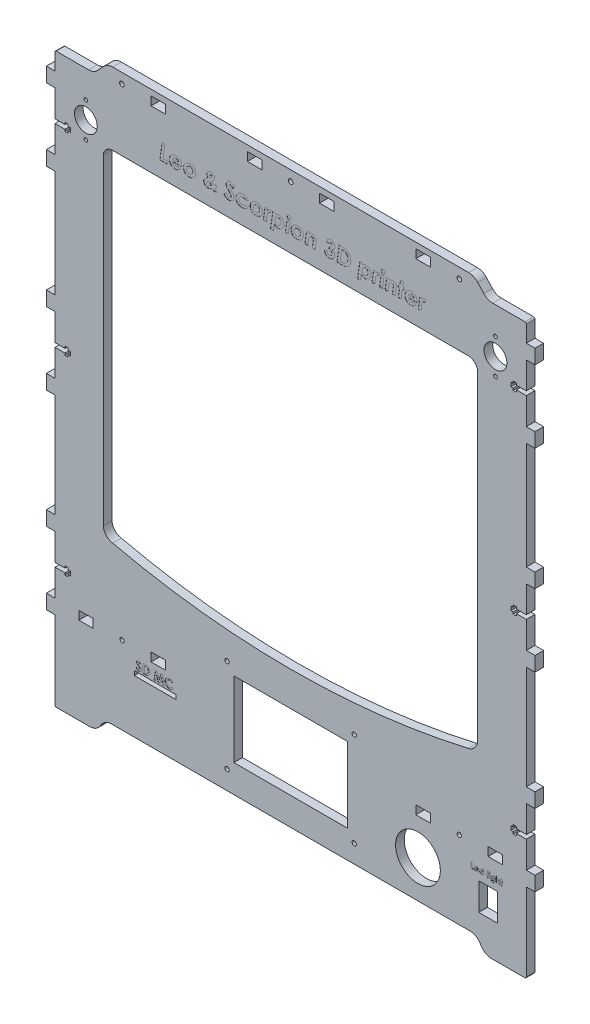
from build123d import *

# Parameters (mm, degrees)
SKETCH_1_R          = 1.5
SKETCH_1_R_2        = 15.5
SKETCH_1_R_3        = 1.6
SKETCH_1_R_4        = 7.9
SKETCH_1_R_5        = 1.25
SKETCH_1_W          = 10
SKETCH_1_H          = 6
SKETCH_1_W_2        = 78.6
SKETCH_1_H_2        = 51.99959895
SKETCH_1_W_3        = 13
SKETCH_1_H_3        = 19
SKETCH_1_W_4        = 29
SKETCH_1_H_4        = 3
EXTRUDE_2_DEPTH     = 6
CUT_EXTRUDE_1_DEPTH = 0.1
CUT_EXTRUDE_2_DEPTH = 0.1
SKETCH_4_W          = 0.717948718
SKETCH_4_H          = 4.102564103
SKETCH_4_H_2        = 2.923076923
CUT_EXTRUDE_3_DEPTH = 0.1


with BuildPart() as part:
    # Эскиз1 → Бобышка-Вытянуть2 (new body)
    with BuildSketch(Plane.XY):
        with BuildLine():
            Line((-162.349245127, -146.930877786), (-168.354558228, -146.930877786))
            Line((-168.354558228, -146.930877786), (-168.354558228, -136.930877786))
            Line((-168.354558228, -136.930877786), (-162.354558228, -136.930877786))
            Line((-162.354558228, -136.930877786), (-162.354558228, -118.320877786))
            Line((-162.354558228, -118.320877786), (-155.442615928, -118.320877786))
            Line((-155.442615928, -118.320877786), (-155.442615928, -119.72098181))
            Line((-155.442615928, -119.72098181), (-153.241793345, -119.72098181))
            Line((-153.241793345, -119.72098181), (-153.241793345, -118.321100605))
            Line((-153.241793345, -118.321100605), (-151.743644127, -118.321100605))
            Line((-151.743644127, -118.321100605), (-151.743644127, -115.521795283))
            Line((-151.743644127, -115.521795283), (-153.245115684, -115.521795283))
            Line((-153.245115684, -115.521795283), (-153.245115684, -114.120877786))
            Line((-153.245115684, -114.120877786), (-155.445116095, -114.120877786))
            Line((-155.445116095, -114.120877786), (-155.445116095, -115.520877786))
            Line((-155.445116095, -115.520877786), (-162.354558228, -115.520877786))
            Line((-162.354558228, -115.520877786), (-162.354558228, -96.940877786))
            Line((-162.354558228, -96.940877786), (-168.354558228, -96.940877786))
            Line((-168.354558228, -96.940877786), (-168.354558228, -86.940877786))
            Line((-168.354558228, -86.940877786), (-162.354558228, -86.940877786))
            Line((-162.354558228, -86.940877786), (-162.354558228, -15.210877786))
            Line((-162.354558228, -15.210877786), (-168.354558228, -15.210877786))
            Line((-168.354558228, -15.210877786), (-168.354558228, -5.210877786))
            Line((-168.354558228, -5.210877786), (-162.354558228, -5.210877786))
            Line((-162.354558228, -5.210877786), (-162.354558228, 13.389122214))
            Line((-162.354558228, 13.389122214), (-155.444055652, 13.389122214))
            Line((-155.444055652, 13.389122214), (-155.444055652, 11.989017706))
            Line((-155.444055652, 11.989017706), (-153.243233069, 11.989017706))
            Line((-153.243233069, 11.989017706), (-153.243233069, 13.362239479))
            Line((-153.243233069, 13.362239479), (-151.742761748, 13.362239479))
            Line((-151.742761748, 13.362239479), (-151.742761748, 16.188530845))
            Line((-151.742761748, 16.188530845), (-153.245115684, 16.188530845))
            Line((-153.245115684, 16.188530845), (-153.245115684, 17.589122214))
            Line((-153.245115684, 17.589122214), (-155.445116095, 17.589122214))
            Line((-155.445116095, 17.589122214), (-155.445116095, 16.189122214))
            Line((-155.445116095, 16.189122214), (-162.354558228, 16.189122214))
            Line((-162.354558228, 16.189122214), (-162.354558228, 34.789122214))
            Line((-162.354558228, 34.789122214), (-168.354558228, 34.789122214))
            Line((-168.354558228, 34.789122214), (-168.354558228, 44.789122214))
            Line((-168.354558228, 44.789122214), (-162.354558228, 44.789122214))
            Line((-162.354558228, 44.789122214), (-162.354558228, 118.949122214))
            Line((-162.354558228, 118.949122214), (-168.354558228, 118.949122214))
            Line((-168.354558228, 118.949122214), (-168.354558228, 128.949122214))
            Line((-168.354558228, 128.949122214), (-162.354558228, 128.949122214))
            Line((-162.354558228, 128.949122214), (-162.354558228, 147.549122214))
            Line((-162.354558228, 147.549122214), (-155.444087484, 147.549122214))
            Line((-155.444087484, 147.549122214), (-155.444087484, 146.149017702))
            Line((-155.444087484, 146.149017702), (-153.243264902, 146.149017702))
            Line((-153.243264902, 146.149017702), (-153.243264902, 147.548898907))
            Line((-153.243264902, 147.548898907), (-151.737469071, 147.548898907))
            Line((-151.737469071, 147.548898907), (-151.737951164, 150.348204717))
            Line((-151.737951164, 150.348204717), (-153.239802583, 150.348204717))
            Line((-153.239802583, 150.348204717), (-153.239802583, 151.749122214))
            Line((-153.239802583, 151.749122214), (-155.439802995, 151.749122214))
            Line((-155.439802995, 151.749122214), (-155.439802995, 150.349122214))
            Line((-155.439802995, 150.349122214), (-162.349245127, 150.349122214))
            Line((-162.349245127, 150.349122214), (-162.349245127, 168.949122214))
            Line((-162.349245127, 168.949122214), (-168.349245127, 168.949122214))
            Line((-168.349245127, 168.949122214), (-168.349245127, 178.949122214))
            Line((-168.349245127, 178.949122214), (-162.349245127, 178.949122214))
            Line((-162.349245127, 178.949122214), (-162.349245127, 190.349122214))
            ThreePointArc((-162.349245127, 190.349122214), (-162.144381362, 191.019766001), (-161.525304034, 191.349122214))
            Line((-161.525304034, 191.349122214), (-139.092392644, 191.349122214))
            ThreePointArc((-139.092392644, 191.349122214), (-135.666701236, 192.070006687), (-132.82207518, 194.110383773))
            Line((-132.82207518, 194.110383773), (-128.724185584, 198.587860655))
            ThreePointArc((-128.724185584, 198.587860655), (-125.879559527, 200.62823774), (-122.453868119, 201.349122214))
            Line((-122.453868119, 201.349122214), (123.955377865, 201.349122214))
            ThreePointArc((123.955377865, 201.349122214), (127.381069274, 200.62823774), (130.22569533, 198.587860655))
            Line((130.22569533, 198.587860655), (134.323584926, 194.110383773))
            ThreePointArc((134.323584926, 194.110383773), (137.168210982, 192.070006687), (140.59390239, 191.349122214))
            Line((140.59390239, 191.349122214), (162.850754873, 191.349122214))
            ThreePointArc((162.850754873, 191.349122214), (163.557861654, 191.056228995), (163.850754873, 190.349122214))
            Line((163.850754873, 190.349122214), (163.850754873, 178.949122214))
            Line((163.850754873, 178.949122214), (169.850754873, 178.949122214))
            Line((169.850754873, 178.949122214), (169.850754873, 168.949122214))
            Line((169.850754873, 168.949122214), (163.850754873, 168.949122214))
            Line((163.850754873, 168.949122214), (163.850754873, 150.349122214))
            Line((163.850754873, 150.349122214), (156.938753666, 150.349122214))
            Line((156.938753666, 150.349122214), (156.938753666, 151.74917383))
            Line((156.938753666, 151.74917383), (154.741012446, 151.74917383))
            Line((154.741012446, 151.74917383), (154.741012446, 150.349292624))
            Line((154.741012446, 150.349292624), (153.241012446, 150.349292624))
            Line((153.241012446, 150.349292624), (153.241012446, 147.550209336))
            Line((153.241012446, 147.550209336), (154.741012446, 147.550209336))
            Line((154.741012446, 147.550209336), (154.741012446, 146.149291839))
            Line((154.741012446, 146.149291839), (156.941736218, 146.149291839))
            Line((156.941736218, 146.149291839), (156.941736218, 147.549122214))
            Line((156.941736218, 147.549122214), (163.851237257, 147.549122214))
            Line((163.851237257, 147.549122214), (163.851237257, 128.949122214))
            Line((163.851237257, 128.949122214), (169.851237081, 128.949122214))
            Line((169.851237081, 128.949122214), (169.851237081, 118.949122214))
            Line((169.851237081, 118.949122214), (163.851237081, 118.949122214))
            Line((163.851237081, 118.949122214), (163.851237081, 44.789122214))
            Line((163.851237081, 44.789122214), (169.851237081, 44.789122214))
            Line((169.851237081, 44.789122214), (169.851237081, 34.789122214))
            Line((169.851237081, 34.789122214), (163.851237081, 34.789122214))
            Line((163.851237081, 34.789122214), (163.851237081, 16.189122214))
            Line((163.851237081, 16.189122214), (156.939202586, 16.189122214))
            Line((156.939202586, 16.189122214), (156.939202586, 17.562103605))
            Line((156.939202586, 17.562103605), (154.739101533, 17.562103605))
            Line((154.739101533, 17.562103605), (154.739101533, 16.189291862))
            Line((154.739101533, 16.189291862), (153.239956889, 16.189291862))
            Line((153.239956889, 16.189291862), (153.239956889, 13.39020884))
            Line((153.239956889, 13.39020884), (154.741461365, 13.39020884))
            Line((154.741461365, 13.39020884), (154.741461365, 11.989291851))
            Line((154.741461365, 11.989291851), (156.941702753, 11.989291851))
            Line((156.941702753, 11.989291851), (156.941702753, 13.389122214))
            Line((156.941702753, 13.389122214), (163.851237081, 13.389122214))
            Line((163.851237081, 13.389122214), (163.851237081, -5.210877786))
            Line((163.851237081, -5.210877786), (169.851237081, -5.210877786))
            Line((169.851237081, -5.210877786), (169.851237081, -15.210877786))
            Line((169.851237081, -15.210877786), (163.851237081, -15.210877786))
            Line((163.851237081, -15.210877786), (163.851237081, -86.940877786))
            Line((163.851237081, -86.940877786), (169.851237081, -86.940877786))
            Line((169.851237081, -86.940877786), (169.851237081, -96.940877786))
            Line((169.851237081, -96.940877786), (163.939237081, -96.940877786))
            Line((163.939237081, -96.940877786), (163.939237081, -115.520877786))
            Line((163.939237081, -115.520877786), (156.93923577, -115.520877786))
            Line((156.93923577, -115.520877786), (156.93923577, -114.122358317))
            Line((156.93923577, -114.122358317), (154.738205666, -114.122358317))
            Line((154.738205666, -114.122358317), (154.738205666, -115.522239523))
            Line((154.738205666, -115.522239523), (153.238413576, -115.522239523))
            Line((153.238413576, -115.522239523), (153.238413576, -118.322187164))
            Line((153.238413576, -118.322187164), (154.740539372, -118.322187164))
            Line((154.740539372, -118.322187164), (154.740539372, -119.723103854))
            Line((154.740539372, -119.723103854), (156.939923762, -119.723103854))
            Line((156.939923762, -119.723103854), (156.939923762, -118.320877786))
            Line((156.939923762, -118.320877786), (163.851344603, -118.320877786))
            Line((163.851344603, -118.320877786), (163.851344603, -136.930877786))
            Line((163.851344603, -136.930877786), (169.845441772, -136.930877786))
            Line((169.845441772, -136.930877786), (169.845441772, -146.930877786))
            Line((169.845441772, -146.930877786), (163.845441772, -146.930877786))
            Line((163.845441772, -146.930877786), (163.845441772, -200.973061911))
            ThreePointArc((163.845441772, -200.973061911), (163.501928515, -201.680136073), (162.762754873, -201.947675896))
            Line((162.762754873, -201.947675896), (139.726369967, -201.947675896))
            ThreePointArc((139.726369967, -201.947675896), (136.178541077, -201.14298723), (133.302992201, -198.914572468))
            Line((133.302992201, -198.914572468), (131.246288055, -195.894919373))
            ThreePointArc((131.246288055, -195.894919373), (128.327165513, -193.654997866), (124.734910288, -192.858614055))
            Line((124.734910288, -192.858614055), (-123.233400542, -192.858614055))
            ThreePointArc((-123.233400542, -192.858614055), (-126.825655767, -193.654997866), (-129.744778309, -195.894919373))
            Line((-129.744778309, -195.894919373), (-131.801482455, -198.914572469))
            ThreePointArc((-131.801482455, -198.914572469), (-134.720604996, -201.154493976), (-138.312860221, -201.950877786))
            Line((-138.312860221, -201.950877786), (-161.437304034, -201.950877786))
            ThreePointArc((-161.437304034, -201.950877786), (-162.093143033, -201.646865801), (-162.349245127, -200.970877786))
            Line((-162.349245127, -200.970877786), (-162.349245127, -146.930877786))
        make_face()
        with Locations((44.745441772, -115.136083352)):
            Circle(SKETCH_1_R, mode=Mode.SUBTRACT)
        with Locations((44.745441772, -180.385682302)):
            Circle(SKETCH_1_R, mode=Mode.SUBTRACT)
        with Locations((-43.254558228, -179.882480412)):
            Circle(SKETCH_1_R, mode=Mode.SUBTRACT)
        with Locations((-43.254558228, -115.136083352)):
            Circle(SKETCH_1_R, mode=Mode.SUBTRACT)
        with Locations((88.845441772, -166.947675896)):
            Circle(SKETCH_1_R_2, mode=Mode.SUBTRACT)
        with Locations((0.750754873, 194.349122214)):
            Circle(SKETCH_1_R_3, mode=Mode.SUBTRACT)
        with Locations((-116.049245127, 194.349122214)):
            Circle(SKETCH_1_R_3, mode=Mode.SUBTRACT)
        with Locations((117.550754873, 194.349122214)):
            Circle(SKETCH_1_R_3, mode=Mode.SUBTRACT)
        with Locations((-140.999245127, 160.349122214)):
            Circle(SKETCH_1_R_4, mode=Mode.SUBTRACT)
        with Locations((142.500754873, 160.349122214)):
            Circle(SKETCH_1_R_4, mode=Mode.SUBTRACT)
        with Locations((-115.994558228, -138.947675896)):
            Circle(SKETCH_1_R, mode=Mode.SUBTRACT)
        with Locations((117.485441772, -138.947675896)):
            Circle(SKETCH_1_R, mode=Mode.SUBTRACT)
        with Locations((-140.999245127, 172.349122214)):
            Circle(SKETCH_1_R_5, mode=Mode.SUBTRACT)
        with Locations((-140.999245127, 148.349122214)):
            Circle(SKETCH_1_R_5, mode=Mode.SUBTRACT)
        with Locations((142.500754873, 172.349122214)):
            Circle(SKETCH_1_R_5, mode=Mode.SUBTRACT)
        with Locations((142.500754873, 148.349122214)):
            Circle(SKETCH_1_R_5, mode=Mode.SUBTRACT)
        with Locations((-90.889245127, 194.349122214)):
            Rectangle(SKETCH_1_W, SKETCH_1_H, mode=Mode.SUBTRACT)
        with Locations((92.390754873, 194.349122214)):
            Rectangle(SKETCH_1_W, SKETCH_1_H, mode=Mode.SUBTRACT)
        with Locations((92.365441772, -138.947675896)):
            Rectangle(SKETCH_1_W, SKETCH_1_H, mode=Mode.SUBTRACT)
        with Locations((142.385441772, -138.947675896)):
            Rectangle(SKETCH_1_W, SKETCH_1_H, mode=Mode.SUBTRACT)
        with Locations((-140.894558228, -138.947675896)):
            Rectangle(SKETCH_1_W, SKETCH_1_H, mode=Mode.SUBTRACT)
        with Locations((-90.874558228, -138.947675896)):
            Rectangle(SKETCH_1_W, SKETCH_1_H, mode=Mode.SUBTRACT)
        with Locations((-24.239245127, 194.349122214)):
            Rectangle(SKETCH_1_W, SKETCH_1_H, mode=Mode.SUBTRACT)
        with Locations((25.740754873, 194.349122214)):
            Rectangle(SKETCH_1_W, SKETCH_1_H, mode=Mode.SUBTRACT)
        with BuildLine():
            Line((-122.399111136, 151.349122214), (123.624117201, 151.349122214))
            ThreePointArc((123.624117201, 151.349122214), (128.051771635, 149.629783996), (130.158760923, 145.372925549))
            Line((130.158760923, 145.372925549), (130.125352868, -76.974184913))
            ThreePointArc((130.125352868, -76.974184913), (127.977308293, -81.497473491), (123.648924914, -84.015276578))
            ThreePointArc((123.648924914, -84.015276578), (0.588905308, -98.015276578), (-122.471114299, -84.015276578))
            ThreePointArc((-122.471114299, -84.015276578), (-126.930378694, -81.617835611), (-128.947210492, -76.974006197))
            Line((-128.947210492, -76.974006197), (-128.934108856, 145.37292555))
            ThreePointArc((-128.934108856, 145.37292555), (-126.846261851, 149.650978449), (-122.399111136, 151.349122214))
        make_face(mode=Mode.SUBTRACT)
        with Locations((0.745441772, -147.635882827)):
            Rectangle(SKETCH_1_W_2, SKETCH_1_H_2, mode=Mode.SUBTRACT)
        with Locations((137.438754873, -169.176180946)):
            Rectangle(SKETCH_1_W_3, SKETCH_1_H_3, mode=Mode.SUBTRACT)
        with Locations((-93.004246156, -154.427084063)):
            Rectangle(SKETCH_1_W_4, SKETCH_1_H_4, mode=Mode.SUBTRACT)
    extrude(amount=EXTRUDE_2_DEPTH)

    # Эскиз2 → Вырез-Вытянуть1 (cut)
    # profile 1 of 23: a face of its own
    with BuildSketch(Plane.XY.offset(6)):
        Polygon((-88.245659842, 173.022365807), (-86.251469137, 173.022365807), (-87.538328112, 163.855699141), (-84.14710215, 163.855699141), (-84.385082919, 162.022365807), (-89.788127791, 162.022365807), align=None)
    # profile 2 of 23: a face of its own
    with BuildSketch(Plane.XY.offset(6)):
        with BuildLine():
            Line((-77.254473945, 164.399969974), (-75.529113368, 163.514152666))
            add(Edge.make_bspline(
                [(-75.529113368, 163.514152666), (-75.631040747, 163.392199245), (-75.835915287, 163.147072261), (-76.204218571, 162.829371125), (-76.616281429, 162.547751364), (-77.073543778, 162.309605133), (-77.567366112, 162.116710035), (-78.092085537, 161.982448889), (-78.641934983, 161.894452902), (-79.017680227, 161.885764237), (-79.209001189, 161.881340166)],
                knots=[0, 0, 0, 0, 0.914244933, 1.837636877, 2.790537697, 3.784087733, 4.800790172, 5.83726639, 6.89878507, 8, 8, 8, 8], degree=3))
            add(Edge.make_bspline(
                [(-79.209001189, 161.881340166), (-79.358262171, 161.883877097), (-79.648805391, 161.888815348), (-80.072363034, 161.939484766), (-80.472624928, 162.01663672), (-80.847556776, 162.130095659), (-81.200353292, 162.270634455), (-81.526662045, 162.447414623), (-81.828606654, 162.656872078), (-82.106214775, 162.893313104), (-82.35289197, 163.15923699), (-82.570379885, 163.44538603), (-82.751657398, 163.755404226), (-82.90291377, 164.083993539), (-83.01653355, 164.43578976), (-83.101095465, 164.806459543), (-83.14916845, 165.199328898), (-83.156280791, 165.467818504), (-83.159922663, 165.6052985)],
                knots=[0, 0, 0, 0, 1.167516698, 2.272623801, 3.333371772, 4.353538571, 5.333382306, 6.300396664, 7.250661637, 8.204535574, 9.148031545, 10.083792083, 11.011414416, 11.952824574, 12.908912643, 13.898953575, 14.92416002, 16, 16, 16, 16], degree=3))
            add(Edge.make_bspline(
                [(-83.159922663, 165.6052985), (-83.156663558, 165.763457061), (-83.150253744, 166.07451392), (-83.083274265, 166.530320608), (-82.980098638, 166.968082496), (-82.835486921, 167.387552275), (-82.644755824, 167.786854643), (-82.418614371, 168.170618773), (-82.14501307, 168.531964866), (-81.835825575, 168.871815851), (-81.497864052, 169.181412379), (-81.139522074, 169.455065385), (-80.762008007, 169.685769637), (-80.368111644, 169.875564293), (-79.955974372, 170.022963006), (-79.526544907, 170.124790564), (-79.080379328, 170.192058081), (-78.776623756, 170.198561149), (-78.622863368, 170.201852987)],
                knots=[0, 0, 0, 0, 1.05529311, 2.075487762, 3.068699193, 4.055083011, 5.031283693, 6.018666653, 7.023995929, 8.051577733, 9.082465902, 10.079966066, 11.057287041, 12.031169187, 12.994424047, 13.973330935, 14.974104677, 16, 16, 16, 16], degree=3))
            add(Edge.make_bspline(
                [(-78.622863368, 170.201852987), (-78.529551965, 170.199781991), (-78.345614858, 170.195699607), (-78.073065989, 170.174635787), (-77.809326741, 170.133540418), (-77.552516317, 170.082356125), (-77.304757983, 170.010735156), (-77.064695041, 169.924050557), (-76.829849626, 169.826467466), (-76.606035857, 169.707980396), (-76.389209372, 169.579878809), (-76.186349156, 169.432105793), (-75.992252335, 169.274668773), (-75.810304683, 169.102153805), (-75.643301967, 168.913614207), (-75.485627275, 168.712558323), (-75.34102443, 168.496112732), (-75.206576815, 168.268630333), (-75.088880807, 168.029852729), (-74.981802084, 167.787605776), (-74.897025327, 167.537582416), (-74.822248942, 167.284620399), (-74.769553314, 167.023999236), (-74.72506648, 166.759800322), (-74.704817197, 166.489960626), (-74.700538113, 166.308977795), (-74.698384201, 166.217878628)],
                knots=[0, 0, 0, 0, 1.072343926, 2.113823519, 3.137889586, 4.13760148, 5.120645553, 6.097657508, 7.069516392, 8.039614793, 9.005002879, 9.960565349, 10.920144366, 11.87525951, 12.837543921, 13.811635494, 14.808779264, 15.826321551, 16.845367656, 17.865985152, 18.866871901, 19.876579391, 20.894541571, 21.919893521, 22.952961626, 24, 24, 24, 24], degree=3))
            add(Edge.make_bspline(
                [(-74.698384201, 166.217878628), (-74.699326052, 166.15763015), (-74.701280714, 166.032593923), (-74.715023024, 165.836962819), (-74.73958574, 165.626847856), (-74.761824532, 165.481835677), (-74.773304073, 165.406981192)],
                knots=[0, 0, 0, 0, 0.886860648, 1.840539587, 2.885298471, 4, 4, 4, 4], degree=3))
            Line((-74.773304073, 165.406981192), (-81.185563689, 165.406981192))
            add(Edge.make_bspline(
                [(-81.185563689, 165.406981192), (-81.181356075, 165.343731163), (-81.173147991, 165.220344944), (-81.145437857, 165.040539535), (-81.098318978, 164.871701753), (-81.036161726, 164.712683412), (-80.961145101, 164.561661939), (-80.871041367, 164.419322477), (-80.761960849, 164.290023682), (-80.640128864, 164.16972313), (-80.504328764, 164.062264596), (-80.355153636, 163.969832508), (-80.1952549, 163.888490094), (-80.020675819, 163.826533123), (-79.835348142, 163.774792643), (-79.637468642, 163.740765275), (-79.427708, 163.717521672), (-79.283255536, 163.715640498), (-79.209001189, 163.7146735)],
                knots=[0, 0, 0, 0, 1.040300458, 2.029386266, 2.980027991, 3.911437883, 4.828060054, 5.744444316, 6.66911896, 7.598419554, 8.551199615, 9.504589747, 10.47513087, 11.489753162, 12.539789264, 13.630032591, 14.781741895, 16, 16, 16, 16], degree=3))
            add(Edge.make_bspline(
                [(-79.209001189, 163.7146735), (-79.118589192, 163.717022375), (-78.939445384, 163.721676476), (-78.674330045, 163.751769495), (-78.417556941, 163.80837549), (-78.168464598, 163.883131748), (-77.926089813, 163.977102511), (-77.694881987, 164.098567585), (-77.468004062, 164.236467343), (-77.326256918, 164.34500487), (-77.254473945, 164.399969974)],
                knots=[0, 0, 0, 0, 1.027214308, 2.035339218, 3.025519259, 4.010199041, 4.987959988, 5.973205312, 6.973599434, 8, 8, 8, 8], degree=3))
        make_face()
        with BuildLine():
            add(Edge.make_bspline(
                [(-76.813768817, 166.817237602), (-76.852951033, 166.938302544), (-76.928397012, 167.171415017), (-77.092970377, 167.487873656), (-77.293864349, 167.758260902), (-77.531326004, 167.980636105), (-77.800808512, 168.15382114), (-78.097176558, 168.279078376), (-78.420636849, 168.356237133), (-78.645930483, 168.364350855), (-78.761685483, 168.368519653)],
                knots=[0, 0, 0, 0, 1.131480038, 2.178682812, 3.159669316, 4.117470342, 5.058967564, 5.99670948, 6.970717055, 8, 8, 8, 8], degree=3))
            add(Edge.make_bspline(
                [(-78.761685483, 168.368519653), (-78.877489419, 168.364452783), (-79.105911762, 168.356430913), (-79.437785394, 168.27469624), (-79.753942399, 168.148794929), (-80.047544613, 167.96868985), (-80.319297705, 167.746601746), (-80.55254777, 167.475298619), (-80.758110056, 167.166563718), (-80.858506341, 166.935852784), (-80.910122983, 166.817237602)],
                knots=[0, 0, 0, 0, 0.983432494, 1.939812791, 2.890131691, 3.868528921, 4.858194814, 5.863362488, 6.901492691, 8, 8, 8, 8], degree=3))
            Line((-80.910122983, 166.817237602), (-76.813768817, 166.817237602))
        make_face(mode=Mode.SUBTRACT)
    # profile 3 of 23: a face of its own
    with BuildSketch(Plane.XY.offset(6)):
        with BuildLine():
            add(Edge.make_bspline(
                [(-68.792935483, 170.201852987), (-68.703990125, 170.201033138), (-68.527955357, 170.199410547), (-68.266988373, 170.172776723), (-68.011443557, 170.136660246), (-67.762548422, 170.083847927), (-67.520522936, 170.014845351), (-67.284342502, 169.930790052), (-67.053423422, 169.832528387), (-66.830960695, 169.717232686), (-66.617150036, 169.589811736), (-66.413950858, 169.449282389), (-66.224747234, 169.293617946), (-66.044233694, 169.128890245), (-65.880014841, 168.947629021), (-65.727626523, 168.754994356), (-65.585226693, 168.551095171), (-65.456169712, 168.334675295), (-65.342518424, 168.107059872), (-65.239885027, 167.874089872), (-65.156025874, 167.632175009), (-65.089241833, 167.383623379), (-65.031709883, 167.128998287), (-64.996970458, 166.867144528), (-64.969919402, 166.598915243), (-64.968390426, 166.417739112), (-64.967614971, 166.325851384)],
                knots=[0, 0, 0, 0, 1.048380346, 2.074885017, 3.090367486, 4.090964834, 5.072523792, 6.056029873, 7.045505985, 8.029469653, 9.008388104, 9.979110116, 10.939576094, 11.895736256, 12.858269977, 13.820062943, 14.790784955, 15.789017664, 16.788414625, 17.789274365, 18.789121639, 19.804049856, 20.823403653, 21.864603227, 22.916983403, 24, 24, 24, 24], degree=3))
            add(Edge.make_bspline(
                [(-64.967614971, 166.325851384), (-64.972117788, 166.174346257), (-64.980986476, 165.875943819), (-65.043169206, 165.436970665), (-65.149443928, 165.016150778), (-65.298223712, 164.612266749), (-65.488536313, 164.22521308), (-65.721171746, 163.854642911), (-65.998845286, 163.504417553), (-66.311920789, 163.173725014), (-66.655459508, 162.870783989), (-67.023822779, 162.605800342), (-67.412281481, 162.381794975), (-67.819867114, 162.196977598), (-68.249550658, 162.056491233), (-68.698146031, 161.955870818), (-69.166406516, 161.891488149), (-69.485363128, 161.88476585), (-69.647903432, 161.881340166)],
                knots=[0, 0, 0, 0, 1.011104245, 1.991457176, 2.952197104, 3.902991464, 4.858928698, 5.826026836, 6.817568841, 7.837123857, 8.861887107, 9.870051414, 10.860623363, 11.850212162, 12.851715058, 13.872153699, 14.915649431, 16, 16, 16, 16], degree=3))
            add(Edge.make_bspline(
                [(-69.647903432, 161.881340166), (-69.788354625, 161.883925175), (-70.062793159, 161.888976226), (-70.462954903, 161.939375701), (-70.84193332, 162.016934408), (-71.198681541, 162.130758258), (-71.534620228, 162.272975529), (-71.848377286, 162.449172355), (-72.140751628, 162.656060878), (-72.405804362, 162.897325637), (-72.647084519, 163.161177921), (-72.856222737, 163.448253663), (-73.035092903, 163.754768242), (-73.177203016, 164.082422139), (-73.290433268, 164.428362239), (-73.371732902, 164.793510248), (-73.421259314, 165.178648608), (-73.426484417, 165.442086783), (-73.429153432, 165.576652666)],
                knots=[0, 0, 0, 0, 1.130534475, 2.209039425, 3.242686211, 4.241648197, 5.219495055, 6.175504508, 7.134035888, 8.097337106, 9.056251676, 10.008649417, 10.952170628, 11.908308165, 12.879116703, 13.879338768, 14.916752852, 16, 16, 16, 16], degree=3))
            add(Edge.make_bspline(
                [(-73.429153432, 165.576652666), (-73.424801299, 165.739172631), (-73.416239695, 166.058885128), (-73.352221463, 166.52814986), (-73.241314762, 166.975292306), (-73.088119624, 167.40111252), (-72.894657404, 167.807615819), (-72.651134981, 168.189646653), (-72.368588973, 168.553431012), (-72.043416368, 168.888943321), (-71.691322241, 169.195011234), (-71.321753324, 169.465756638), (-70.934308067, 169.690949219), (-70.53547476, 169.88114125), (-70.118540101, 170.02324189), (-69.689528555, 170.127587127), (-69.245838584, 170.191294152), (-68.94518792, 170.198303423), (-68.792935483, 170.201852987)],
                knots=[0, 0, 0, 0, 1.070407058, 2.105725986, 3.11260329, 4.099768105, 5.082273654, 6.071629737, 7.078227986, 8.111679688, 9.144009435, 10.148605521, 11.124500349, 12.092034995, 13.054511379, 14.020338642, 14.997480131, 16, 16, 16, 16], degree=3))
        make_face()
        with BuildLine():
            add(Edge.make_bspline(
                [(-68.938368176, 168.368519653), (-69.036930964, 168.366122563), (-69.229019409, 168.361450886), (-69.508257872, 168.321033798), (-69.769916104, 168.255191876), (-70.014977055, 168.163014457), (-70.240175975, 168.040031758), (-70.450469911, 167.894210774), (-70.639751888, 167.718329395), (-70.81031158, 167.520607255), (-70.960652626, 167.30739421), (-71.092776357, 167.088040237), (-71.204605679, 166.863429408), (-71.29350348, 166.63412989), (-71.368650056, 166.401641173), (-71.418580395, 166.163828064), (-71.447530808, 165.921120002), (-71.452356285, 165.758153535), (-71.454794458, 165.67581132)],
                knots=[0, 0, 0, 0, 1.147646984, 2.236642535, 3.278363253, 4.285788599, 5.277283386, 6.259990092, 7.25913394, 8.278119336, 9.296601724, 10.294389209, 11.258634566, 12.215104854, 13.156804447, 14.101569642, 15.040778374, 16, 16, 16, 16], degree=3))
            add(Edge.make_bspline(
                [(-71.454794458, 165.67581132), (-71.452962551, 165.603770583), (-71.44938154, 165.462945374), (-71.425484588, 165.256987202), (-71.383052902, 165.062531569), (-71.32650868, 164.878163948), (-71.250452047, 164.704873294), (-71.158679991, 164.541992245), (-71.048529349, 164.391127439), (-70.926728084, 164.249513148), (-70.78704004, 164.124713011), (-70.637529625, 164.014331489), (-70.477070264, 163.919869915), (-70.30398948, 163.845975523), (-70.120646901, 163.785641733), (-69.926333194, 163.74442959), (-69.721250923, 163.719893468), (-69.581133267, 163.71644618), (-69.509081317, 163.7146735)],
                knots=[0, 0, 0, 0, 1.110133544, 2.170088686, 3.189065258, 4.17351184, 5.136579884, 6.099647928, 7.048308506, 8.010844321, 8.972448026, 9.927769731, 10.871216919, 11.834284962, 12.822174017, 13.841150589, 14.889866456, 16, 16, 16, 16], degree=3))
            add(Edge.make_bspline(
                [(-69.509081317, 163.7146735), (-69.407607189, 163.717286774), (-69.209818611, 163.722380446), (-68.922488601, 163.759721298), (-68.654071649, 163.823130309), (-68.404645946, 163.913912894), (-68.174473083, 164.031843233), (-67.960722692, 164.172750152), (-67.768238088, 164.342511561), (-67.594915553, 164.53404245), (-67.442620737, 164.742048042), (-67.309668051, 164.960099921), (-67.194414364, 165.184029848), (-67.101426174, 165.416414127), (-67.031077227, 165.655680216), (-66.980225385, 165.901796917), (-66.948663368, 166.155364296), (-66.944218047, 166.327230403), (-66.941973945, 166.41399241)],
                knots=[0, 0, 0, 0, 1.164111062, 2.269030304, 3.317651816, 4.322802953, 5.30652745, 6.278887004, 7.252451034, 8.242831511, 9.237327035, 10.205734188, 11.170614506, 12.123681709, 13.072978069, 14.028315502, 15.004647829, 16, 16, 16, 16], degree=3))
            add(Edge.make_bspline(
                [(-66.941973945, 166.41399241), (-66.943628973, 166.484583321), (-66.946882118, 166.623337752), (-66.973573262, 166.826343959), (-67.018173863, 167.018538635), (-67.076837476, 167.201887465), (-67.157424003, 167.372942081), (-67.251572521, 167.536379393), (-67.368282117, 167.685676882), (-67.497274923, 167.826465001), (-67.639783894, 167.954450062), (-67.795667972, 168.064768462), (-67.960113056, 168.160418435), (-68.136846652, 168.235216143), (-68.322739048, 168.294647841), (-68.518601203, 168.339530743), (-68.725521358, 168.362994169), (-68.866333912, 168.36664965), (-68.938368176, 168.368519653)],
                knots=[0, 0, 0, 0, 1.079193067, 2.121276228, 3.123935011, 4.093589047, 5.058482656, 6.010079462, 6.971567708, 7.949254825, 8.927715837, 9.893916005, 10.864935156, 11.830939453, 12.821955205, 13.846519011, 14.898362312, 16, 16, 16, 16], degree=3))
        make_face(mode=Mode.SUBTRACT)
    # profile 4 of 23: a face of its own
    with BuildSketch(Plane.XY.offset(6)):
        with BuildLine():
            Line((-51.391693496, 166.486708756), (-50.347222342, 165.001532474))
            add(Edge.make_bspline(
                [(-50.347222342, 165.001532474), (-50.480915249, 164.88152351), (-50.74971158, 164.640239435), (-51.036172812, 164.420214955), (-51.180155035, 164.309625423)],
                knots=[0, 0, 0, 0, 0.994752467, 2, 2, 2, 2], degree=3))
            Line((-51.180155035, 164.309625423), (-51.596621381, 163.983503628))
            Line((-51.596621381, 163.983503628), (-51.158119778, 163.401772859))
            add(Edge.make_bspline(
                [(-51.158119778, 163.401772859), (-51.102682421, 163.32931691), (-50.99519786, 163.188835901), (-50.8449539, 162.980739365), (-50.700995886, 162.789393067), (-50.567524487, 162.61160422), (-50.450692061, 162.442988839), (-50.338873793, 162.292433246), (-50.242541115, 162.152124108), (-50.180569392, 162.064175724), (-50.15110856, 162.022365807)],
                knots=[0, 0, 0, 0, 1.281863212, 2.485336816, 3.606181876, 4.646540919, 5.608762026, 6.488216249, 7.28131081, 8, 8, 8, 8], degree=3))
            Line((-50.15110856, 162.022365807), (-52.394297663, 162.022365807))
            add(Edge.make_bspline(
                [(-52.394297663, 162.022365807), (-52.521132725, 162.181769195), (-52.773748951, 162.499251457), (-53.002937753, 162.834036848), (-53.117054073, 163.000731192)],
                knots=[0, 0, 0, 0, 1.004171932, 2, 2, 2, 2], degree=3))
            add(Edge.make_bspline(
                [(-53.117054073, 163.000731192), (-53.254636823, 162.914119071), (-53.529339148, 162.74118641), (-53.962417245, 162.520858159), (-54.406443341, 162.327338672), (-54.859202411, 162.169037454), (-55.310612193, 162.039956632), (-55.753541761, 161.950795733), (-56.182751567, 161.891424872), (-56.464759195, 161.884658042), (-56.603031637, 161.881340166)],
                knots=[0, 0, 0, 0, 1.051528602, 2.099517219, 3.140509109, 4.183755452, 5.200929394, 6.175942994, 7.105638315, 8, 8, 8, 8], degree=3))
            add(Edge.make_bspline(
                [(-56.603031637, 161.881340166), (-56.697200978, 161.882969891), (-56.883380031, 161.886191966), (-57.157328602, 161.926567951), (-57.423703608, 161.984046058), (-57.679604578, 162.071904406), (-57.927807373, 162.179827617), (-58.167319774, 162.311784325), (-58.393942046, 162.473474448), (-58.612925511, 162.650502275), (-58.811288823, 162.847597337), (-58.986930992, 163.055037855), (-59.134558414, 163.271755143), (-59.258857397, 163.495607024), (-59.349590335, 163.730723685), (-59.420330851, 163.972718121), (-59.459872374, 164.224586611), (-59.465021254, 164.395436049), (-59.467614971, 164.481500423)],
                knots=[0, 0, 0, 0, 1.054394664, 2.084608412, 3.097043652, 4.10438012, 5.11063987, 6.127582189, 7.161996355, 8.226463402, 9.279958082, 10.2906519, 11.267807821, 12.214429401, 13.152928409, 14.085706796, 15.035686341, 16, 16, 16, 16], degree=3))
            add(Edge.make_bspline(
                [(-59.467614971, 164.481500423), (-59.466114036, 164.555051348), (-59.463115618, 164.701984109), (-59.432980908, 164.919350654), (-59.387117134, 165.13342537), (-59.320097427, 165.342370527), (-59.236833003, 165.548690446), (-59.131315018, 165.749377258), (-59.01141742, 165.94830259), (-58.867290755, 166.142032712), (-58.699900765, 166.337682774), (-58.497803594, 166.531826694), (-58.2656982, 166.732990573), (-58.000967093, 166.937617281), (-57.702178544, 167.144237392), (-57.371120421, 167.355362544), (-57.0079539, 167.571799723), (-56.751200974, 167.710613351), (-56.618456317, 167.782381833)],
                knots=[0, 0, 0, 0, 0.767250693, 1.5327375, 2.286112574, 3.0498699, 3.820064143, 4.605259776, 5.4138717, 6.241875829, 7.122475201, 8.09830583, 9.163518399, 10.327419758, 11.588556132, 12.953860048, 14.425105369, 16, 16, 16, 16], degree=3))
            add(Edge.make_bspline(
                [(-56.618456317, 167.782381833), (-56.686720962, 167.901713732), (-56.814693626, 168.125419885), (-56.982795092, 168.442752074), (-57.111720276, 168.720170432), (-57.210462156, 168.961692464), (-57.272454852, 169.187285393), (-57.320258448, 169.404663235), (-57.346909297, 169.623863068), (-57.350460503, 169.769897542), (-57.352230355, 169.842678307)],
                knots=[0, 0, 0, 0, 1.489090133, 2.791530419, 3.887840401, 4.802338989, 5.613203498, 6.418349623, 7.211735956, 8, 8, 8, 8], degree=3))
            add(Edge.make_bspline(
                [(-57.352230355, 169.842678307), (-57.349979869, 169.931733665), (-57.345545825, 170.107195896), (-57.301729961, 170.364270315), (-57.233397166, 170.611093617), (-57.137616122, 170.848082881), (-57.016598715, 171.076709477), (-56.864293274, 171.293026958), (-56.687878747, 171.501734688), (-56.482973591, 171.695151864), (-56.261824071, 171.874839848), (-56.022892175, 172.030508355), (-55.77208657, 172.162613014), (-55.5086648, 172.270863541), (-55.232929735, 172.35585002), (-54.944140098, 172.413296479), (-54.643019559, 172.453540236), (-54.437838976, 172.45667011), (-54.333400227, 172.458263243)],
                knots=[0, 0, 0, 0, 0.961348857, 1.894107423, 2.808629313, 3.723701871, 4.650262862, 5.59679267, 6.576277805, 7.597743113, 8.636265097, 9.650895716, 10.673162101, 11.694380798, 12.723522941, 13.784894724, 14.872491639, 16, 16, 16, 16], degree=3))
            add(Edge.make_bspline(
                [(-54.333400227, 172.458263243), (-54.245948463, 172.455732539), (-54.07425075, 172.450763902), (-53.821376699, 172.423917122), (-53.581175714, 172.368629701), (-53.350408527, 172.30048727), (-53.134201482, 172.205396362), (-52.926172551, 172.096298617), (-52.733732402, 171.960607915), (-52.552909127, 171.808909372), (-52.388504107, 171.642723287), (-52.243714684, 171.464222706), (-52.125189494, 171.27270592), (-52.024880179, 171.074135881), (-51.946613699, 170.864419404), (-51.892525269, 170.644034872), (-51.858289483, 170.413725369), (-51.854269171, 170.25706245), (-51.852230355, 170.177614205)],
                knots=[0, 0, 0, 0, 1.114370645, 2.187890589, 3.232145238, 4.250210307, 5.247776489, 6.235687084, 7.237500204, 8.240186745, 9.239199787, 10.210894621, 11.160998601, 12.102448475, 13.040918185, 14.005333625, 14.988447647, 16, 16, 16, 16], degree=3))
            add(Edge.make_bspline(
                [(-51.852230355, 170.177614205), (-51.858241814, 170.046354), (-51.870312532, 169.782789883), (-51.966969037, 169.392605933), (-52.126899752, 169.012698621), (-52.306561564, 168.706406306), (-52.480424083, 168.464277019), (-52.635760222, 168.282858768), (-52.807808538, 168.098980807), (-53.000346348, 167.916430996), (-53.211455511, 167.73323539), (-53.44481202, 167.553202082), (-53.695177524, 167.369566095), (-53.872360282, 167.252077412), (-53.963207919, 167.191836961)],
                knots=[0, 0, 0, 0, 1.236472085, 2.482775914, 3.764983184, 5.11187232, 5.821110656, 6.573016817, 7.361777707, 8.194459886, 9.073291202, 9.995888343, 10.972423666, 12, 12, 12, 12], degree=3))
            add(Edge.make_bspline(
                [(-53.963207919, 167.191836961), (-53.848080993, 167.022979984), (-53.629240766, 166.702006426), (-53.30273557, 166.254231343), (-53.006863233, 165.856624112), (-52.808716363, 165.616349801), (-52.716012407, 165.50393632)],
                knots=[0, 0, 0, 0, 1.167999984, 2.220205034, 3.167314453, 4, 4, 4, 4], degree=3))
            add(Edge.make_bspline(
                [(-52.716012407, 165.50393632), (-52.592202881, 165.590033976), (-52.35187182, 165.757161189), (-52.008923003, 166.009810949), (-51.688368328, 166.247570131), (-51.488157926, 166.408952342), (-51.391693496, 166.486708756)],
                knots=[0, 0, 0, 0, 1.09700461, 2.129434561, 3.098733, 4, 4, 4, 4], degree=3))
        make_face()
        with BuildLine():
            add(Edge.make_bspline(
                [(-54.981236766, 168.688030871), (-54.890051785, 168.750041037), (-54.716695249, 168.867931805), (-54.48236711, 169.054035442), (-54.281735164, 169.234182063), (-54.118453813, 169.411854081), (-53.989057886, 169.585188962), (-53.897305888, 169.756351471), (-53.837485272, 169.924702957), (-53.830116148, 170.037630335), (-53.82658933, 170.091676705)],
                knots=[0, 0, 0, 0, 1.405793702, 2.672627932, 3.813066501, 4.84072383, 5.745622243, 6.562734117, 7.312133113, 8, 8, 8, 8], degree=3))
            add(Edge.make_bspline(
                [(-53.82658933, 170.091676705), (-53.828305699, 170.126575323), (-53.831734978, 170.196302192), (-53.872315423, 170.294844959), (-53.934323594, 170.385736447), (-54.01743543, 170.467782003), (-54.118167926, 170.538345211), (-54.235324997, 170.590480383), (-54.367410236, 170.617939509), (-54.459620342, 170.62254144), (-54.507478753, 170.62492991)],
                knots=[0, 0, 0, 0, 0.869370382, 1.736987803, 2.624650563, 3.613116824, 4.643806866, 5.689648937, 6.8008936, 8, 8, 8, 8], degree=3))
            add(Edge.make_bspline(
                [(-54.507478753, 170.62492991), (-54.566450213, 170.621730768), (-54.680814283, 170.615526633), (-54.846826042, 170.573840527), (-54.995478785, 170.495933857), (-55.128891771, 170.396272778), (-55.23893411, 170.276820533), (-55.317204978, 170.1434472), (-55.369945738, 170.002242731), (-55.375221188, 169.903367331), (-55.377871381, 169.853695936)],
                knots=[0, 0, 0, 0, 1.099517789, 2.132308218, 3.161006571, 4.207052896, 5.22475861, 6.164010403, 7.07766579, 8, 8, 8, 8], degree=3))
            add(Edge.make_bspline(
                [(-55.377871381, 169.853695936), (-55.372889533, 169.765082475), (-55.36239243, 169.578367698), (-55.2806553, 169.293434561), (-55.156851315, 168.990509952), (-55.041888228, 168.792497151), (-54.981236766, 168.688030871)],
                knots=[0, 0, 0, 0, 0.852766973, 1.796839825, 2.83767137, 4, 4, 4, 4], degree=3))
        make_face(mode=Mode.SUBTRACT)
        with BuildLine():
            add(Edge.make_bspline(
                [(-55.532118176, 166.27737382), (-55.755381172, 166.165128959), (-56.210466696, 165.936335955), (-56.638430486, 165.66008462), (-56.856437086, 165.519361)],
                knots=[0, 0, 0, 0, 0.981191378, 2, 2, 2, 2], degree=3))
            add(Edge.make_bspline(
                [(-56.856437086, 165.519361), (-56.910096717, 165.482172398), (-57.01428376, 165.409965968), (-57.153181229, 165.288302308), (-57.273281249, 165.160630953), (-57.335145345, 165.065677), (-57.365451509, 165.019160679)],
                knots=[0, 0, 0, 0, 1.08819534, 2.11287054, 3.075527487, 4, 4, 4, 4], degree=3))
            add(Edge.make_bspline(
                [(-57.365451509, 165.019160679), (-57.402156778, 164.949407233), (-57.473500753, 164.81382757), (-57.486799318, 164.661316402), (-57.493255996, 164.587269653)],
                knots=[0, 0, 0, 0, 1.028966212, 2, 2, 2, 2], degree=3))
            add(Edge.make_bspline(
                [(-57.493255996, 164.587269653), (-57.490056212, 164.526636775), (-57.483798125, 164.408051936), (-57.428926122, 164.238907926), (-57.337778659, 164.087581223), (-57.213608587, 163.954855999), (-57.059253434, 163.847848717), (-56.880700642, 163.769091347), (-56.680282386, 163.722781326), (-56.539376472, 163.717439557), (-56.466413048, 163.7146735)],
                knots=[0, 0, 0, 0, 0.96255174, 1.882543701, 2.794189539, 3.753047341, 4.751308884, 5.760787583, 6.840498588, 8, 8, 8, 8], degree=3))
            add(Edge.make_bspline(
                [(-56.466413048, 163.7146735), (-56.396469619, 163.717502772), (-56.247524248, 163.72352774), (-56.014292235, 163.767232891), (-55.756614214, 163.830061243), (-55.58085256, 163.89154438), (-55.488047663, 163.924008436)],
                knots=[0, 0, 0, 0, 0.83491773, 1.777967332, 2.826732071, 4, 4, 4, 4], degree=3))
            add(Edge.make_bspline(
                [(-55.488047663, 163.924008436), (-55.47188705, 163.931350214), (-55.428496688, 163.95106249), (-55.348074514, 163.987756947), (-55.237970673, 164.040827376), (-55.098820191, 164.110749719), (-54.926513244, 164.18982566), (-54.727080243, 164.291263125), (-54.49426565, 164.40216041), (-54.330316479, 164.484140911), (-54.243055676, 164.527774461)],
                knots=[0, 0, 0, 0, 0.307866358, 0.82660437, 1.533164253, 2.427662039, 3.527481425, 4.820786195, 6.307885609, 8, 8, 8, 8], degree=3))
            add(Edge.make_bspline(
                [(-54.243055676, 164.527774461), (-54.26960558, 164.560742075), (-54.329329872, 164.634903072), (-54.426496419, 164.761114783), (-54.5409203, 164.915509284), (-54.622220645, 165.028594108), (-54.666132599, 165.0896735)],
                knots=[0, 0, 0, 0, 0.722039699, 1.624235951, 2.716801979, 4, 4, 4, 4], degree=3))
            Line((-54.666132599, 165.0896735), (-55.532118176, 166.27737382))
        make_face(mode=Mode.SUBTRACT)
    # profile 5 of 23: a face of its own
    with BuildSketch(Plane.XY.offset(6)):
        with BuildLine():
            Line((-37.75627683, 171.493119012), (-39.285523624, 170.159986))
            add(Edge.make_bspline(
                [(-39.285523624, 170.159986), (-39.361951751, 170.263228613), (-39.508424848, 170.46109118), (-39.740847596, 170.726478198), (-39.963517123, 170.957096319), (-40.187809616, 171.141004364), (-40.406430937, 171.286832797), (-40.621286197, 171.392467928), (-40.83358312, 171.459221044), (-40.975193926, 171.467207051), (-41.043937086, 171.471083756)],
                knots=[0, 0, 0, 0, 1.358515141, 2.603569235, 3.730126198, 4.746094498, 5.666493297, 6.504166865, 7.273866877, 8, 8, 8, 8], degree=3))
            add(Edge.make_bspline(
                [(-41.043937086, 171.471083756), (-41.108870872, 171.468272578), (-41.233747197, 171.462866307), (-41.412998855, 171.41677447), (-41.5759152, 171.34263291), (-41.715785407, 171.235378002), (-41.832604836, 171.111717528), (-41.919344844, 170.972947405), (-41.969861103, 170.819992147), (-41.976863385, 170.714169824), (-41.980435483, 170.66018632)],
                knots=[0, 0, 0, 0, 1.130304997, 2.173727141, 3.204821236, 4.229135679, 5.225705988, 6.15679035, 7.05971714, 8, 8, 8, 8], degree=3))
            add(Edge.make_bspline(
                [(-41.980435483, 170.66018632), (-41.977182295, 170.607004969), (-41.970339858, 170.495148535), (-41.920208564, 170.325575881), (-41.844378353, 170.146905192), (-41.753170844, 169.991550797), (-41.650764458, 169.85048416), (-41.543448982, 169.712451516), (-41.403323457, 169.547416519), (-41.232814353, 169.353489655), (-41.033550625, 169.129034685), (-40.800364021, 168.877317459), (-40.53745316, 168.596684806), (-40.350712919, 168.400694757), (-40.252871381, 168.298006833)],
                knots=[0, 0, 0, 0, 0.642317819, 1.35098826, 2.122816345, 2.986294386, 3.520967692, 4.229638134, 5.099348126, 6.137609051, 7.351336444, 8.727500291, 10.285391505, 12, 12, 12, 12], degree=3))
            add(Edge.make_bspline(
                [(-40.252871381, 168.298006833), (-40.199794853, 168.2431018), (-40.097951309, 168.13774971), (-39.955051325, 167.983886431), (-39.827510151, 167.841284389), (-39.709752733, 167.714938017), (-39.608944847, 167.598323647), (-39.522873932, 167.494239033), (-39.449804922, 167.404148792), (-39.406605758, 167.347640432), (-39.386885804, 167.321844974)],
                knots=[0, 0, 0, 0, 1.403722598, 2.693470914, 3.859630393, 4.920438112, 5.867965235, 6.69256451, 7.40316977, 8, 8, 8, 8], degree=3))
            add(Edge.make_bspline(
                [(-39.386885804, 167.321844974), (-39.308359734, 167.213360249), (-39.156906353, 167.004125553), (-38.96046007, 166.685999713), (-38.797977068, 166.379491558), (-38.670298141, 166.080973599), (-38.574785863, 165.787180775), (-38.505609168, 165.49325669), (-38.462033345, 165.196756491), (-38.457200315, 164.997270084), (-38.454794458, 164.897966769)],
                knots=[0, 0, 0, 0, 1.215130546, 2.343624586, 3.390252636, 4.360992906, 5.286454858, 6.190345157, 7.099163061, 8, 8, 8, 8], degree=3))
            add(Edge.make_bspline(
                [(-38.454794458, 164.897966769), (-38.457788269, 164.788363804), (-38.463680103, 164.572664619), (-38.509334589, 164.256193381), (-38.580444972, 163.952748212), (-38.686481342, 163.664152159), (-38.817410373, 163.387264792), (-38.98358714, 163.126140665), (-39.174752135, 162.876361567), (-39.39544115, 162.643828429), (-39.636988817, 162.431177936), (-39.900007519, 162.247029697), (-40.178018061, 162.090067735), (-40.473846573, 161.960845868), (-40.786591585, 161.862562044), (-41.115695173, 161.792655986), (-41.460549809, 161.746252594), (-41.696759005, 161.742321739), (-41.817374586, 161.740314525)],
                knots=[0, 0, 0, 0, 1.018989505, 2.005376454, 2.968035412, 3.912365187, 4.859556873, 5.811049809, 6.78527381, 7.780773345, 8.787785161, 9.773320145, 10.761314359, 11.752515283, 12.770107012, 13.804505292, 14.878913802, 16, 16, 16, 16], degree=3))
            add(Edge.make_bspline(
                [(-41.817374586, 161.740314525), (-41.909971574, 161.742169889), (-42.093275918, 161.745842753), (-42.364966509, 161.770228736), (-42.630069574, 161.811858782), (-42.888195532, 161.871934028), (-43.139883354, 161.94694651), (-43.385525429, 162.03698613), (-43.624507124, 162.145968595), (-43.857134492, 162.271060032), (-44.083429038, 162.412749672), (-44.30203291, 162.572727592), (-44.515304698, 162.747908769), (-44.720449096, 162.941610992), (-44.92179742, 163.148487406), (-45.115823088, 163.373244213), (-45.300576484, 163.616823425), (-45.417858168, 163.786925199), (-45.477430676, 163.873327346)],
                knots=[0, 0, 0, 0, 1.003438088, 1.986398949, 2.953471805, 3.909242729, 4.856156023, 5.798037682, 6.742035895, 7.700024963, 8.658509928, 9.632892881, 10.633707184, 11.647385023, 12.688779161, 13.761077638, 14.862753205, 16, 16, 16, 16], degree=3))
            Line((-45.477430676, 163.873327346), (-43.849025227, 165.153575743))
            add(Edge.make_bspline(
                [(-43.849025227, 165.153575743), (-43.767916766, 165.028861059), (-43.612355893, 164.789666223), (-43.358798847, 164.46679558), (-43.100298498, 164.192391547), (-42.835916236, 163.967521044), (-42.564801491, 163.792554489), (-42.288900413, 163.667486991), (-42.006985099, 163.587043769), (-41.815686602, 163.578101254), (-41.720419458, 163.573647859)],
                knots=[0, 0, 0, 0, 1.289844872, 2.473840458, 3.555310637, 4.554525788, 5.477014656, 6.343795492, 7.175205895, 8, 8, 8, 8], degree=3))
            add(Edge.make_bspline(
                [(-41.720419458, 163.573647859), (-41.632519095, 163.577500119), (-41.461404408, 163.584999272), (-41.216625648, 163.654821563), (-40.992050414, 163.762457146), (-40.797626824, 163.91614385), (-40.633838573, 164.09663862), (-40.514779143, 164.302260811), (-40.443102452, 164.527555525), (-40.433872935, 164.683704904), (-40.429153432, 164.763551705)],
                knots=[0, 0, 0, 0, 1.07813582, 2.098795369, 3.104167493, 4.120866408, 5.124778177, 6.083335831, 7.019916046, 8, 8, 8, 8], degree=3))
            add(Edge.make_bspline(
                [(-40.429153432, 164.763551705), (-40.431408054, 164.828451209), (-40.435994372, 164.960468764), (-40.483802357, 165.157094454), (-40.554757315, 165.356472015), (-40.640756807, 165.524976184), (-40.733512836, 165.672732174), (-40.831742384, 165.806535688), (-40.955343321, 165.963589711), (-41.108255056, 166.140207898), (-41.284227, 166.342352876), (-41.489926746, 166.562920337), (-41.71878208, 166.809209505), (-41.883102221, 166.977719487), (-41.969417855, 167.066236)],
                knots=[0, 0, 0, 0, 0.82235112, 1.672813781, 2.554588539, 3.50524042, 4.06657461, 4.767804758, 5.610876414, 6.602916144, 7.732569792, 9.01260869, 10.430754915, 12, 12, 12, 12], degree=3))
            add(Edge.make_bspline(
                [(-41.969417855, 167.066236), (-42.060774201, 167.160722733), (-42.237380624, 167.343380696), (-42.487231418, 167.61069941), (-42.712287595, 167.859505184), (-42.912294325, 168.09005982), (-43.087416819, 168.302777765), (-43.240685307, 168.496045293), (-43.367460811, 168.672411888), (-43.438961411, 168.786842744), (-43.472222342, 168.840074141)],
                knots=[0, 0, 0, 0, 1.354401886, 2.618275412, 3.770529779, 4.811580489, 5.763301005, 6.60974666, 7.35327647, 8, 8, 8, 8], degree=3))
            add(Edge.make_bspline(
                [(-43.472222342, 168.840074141), (-43.546487663, 168.972718702), (-43.690575207, 169.23007205), (-43.839118782, 169.63512214), (-43.9359188, 170.034968404), (-43.948572966, 170.301956822), (-43.954794458, 170.433223179)],
                knots=[0, 0, 0, 0, 1.081804801, 2.098888081, 3.065307629, 4, 4, 4, 4], degree=3))
            add(Edge.make_bspline(
                [(-43.954794458, 170.433223179), (-43.952560527, 170.517793226), (-43.94811682, 170.686018848), (-43.916125563, 170.934297734), (-43.867142019, 171.177076486), (-43.789054172, 171.410672574), (-43.698996362, 171.640935252), (-43.581279623, 171.861814137), (-43.449024435, 172.07925158), (-43.34292018, 172.213949047), (-43.289329714, 172.281981192)],
                knots=[0, 0, 0, 0, 1.012167245, 2.013389743, 2.992947912, 3.971795425, 4.958040075, 5.949133471, 6.964161297, 8, 8, 8, 8], degree=3))
            add(Edge.make_bspline(
                [(-43.289329714, 172.281981192), (-43.218585657, 172.363973035), (-43.079052881, 172.525690499), (-42.837634691, 172.73241138), (-42.58166428, 172.910971191), (-42.305631746, 173.054318729), (-42.012711229, 173.168568383), (-41.70011684, 173.246094425), (-41.370244255, 173.296741859), (-41.14402551, 173.301822688), (-41.028512407, 173.304417089)],
                knots=[0, 0, 0, 0, 1.010152455, 1.992384693, 2.959065588, 3.919519142, 4.890305168, 5.888624478, 6.921877408, 8, 8, 8, 8], degree=3))
            add(Edge.make_bspline(
                [(-41.028512407, 173.304417089), (-40.868775464, 173.298840436), (-40.55367097, 173.287839672), (-40.090105498, 173.202336534), (-39.648354653, 173.05740141), (-39.224000416, 172.860483518), (-38.823932938, 172.601154035), (-38.442809185, 172.287672485), (-38.080839469, 171.917804449), (-37.866480073, 171.637318334), (-37.75627683, 171.493119012)],
                knots=[0, 0, 0, 0, 0.984438778, 1.941949542, 2.894274057, 3.844399604, 4.817935388, 5.825099055, 6.88187249, 8, 8, 8, 8], degree=3))
        make_face()
    # profile 6 of 23: a face of its own
    with BuildSketch(Plane.XY.offset(6)):
        with BuildLine():
            Line((-28.512486766, 168.377333756), (-30.270900227, 167.489312923))
            add(Edge.make_bspline(
                [(-30.270900227, 167.489312923), (-30.333863212, 167.560030799), (-30.458245553, 167.699732802), (-30.672082903, 167.878110039), (-30.900714925, 168.029211129), (-31.145284631, 168.153643843), (-31.406104718, 168.251139043), (-31.683600356, 168.31827113), (-31.975772757, 168.362009001), (-32.176052237, 168.366319019), (-32.278312086, 168.368519653)],
                knots=[0, 0, 0, 0, 1.001621577, 1.978686947, 2.938759667, 3.89892692, 4.878559003, 5.880361798, 6.917742926, 8, 8, 8, 8], degree=3))
            add(Edge.make_bspline(
                [(-32.278312086, 168.368519653), (-32.415888647, 168.364100442), (-32.684390334, 168.355475676), (-33.07538092, 168.293642613), (-33.441881245, 168.187653891), (-33.781803588, 168.03908783), (-34.095685513, 167.855385034), (-34.372531679, 167.626410157), (-34.620908036, 167.364697837), (-34.829185906, 167.066554354), (-34.998925613, 166.746990261), (-35.121538416, 166.4128522), (-35.197196792, 166.069224203), (-35.206536306, 165.836306863), (-35.211204714, 165.719881833)],
                knots=[0, 0, 0, 0, 1.123109634, 2.191920126, 3.222507533, 4.229725614, 5.214042815, 6.181627985, 7.153219582, 8.15159619, 9.14152478, 10.099696474, 11.050122689, 12, 12, 12, 12], degree=3))
            add(Edge.make_bspline(
                [(-35.211204714, 165.719881833), (-35.20971404, 165.64633735), (-35.20678041, 165.501602688), (-35.177739253, 165.290383203), (-35.129470661, 165.090069528), (-35.060332178, 164.902117746), (-34.974452904, 164.724167242), (-34.867850731, 164.557779846), (-34.741150775, 164.403606311), (-34.598500204, 164.259583432), (-34.436537405, 164.132064362), (-34.260315214, 164.019455841), (-34.069657905, 163.924478681), (-33.865253558, 163.846903627), (-33.646017187, 163.787436014), (-33.412080227, 163.747055706), (-33.164791118, 163.719241565), (-32.995273125, 163.71621988), (-32.908520419, 163.7146735)],
                knots=[0, 0, 0, 0, 1.023815923, 2.014857467, 2.962663734, 3.888236552, 4.79870464, 5.709632386, 6.633111082, 7.573490415, 8.527295342, 9.497850233, 10.48147211, 11.488436702, 12.538194012, 13.639853934, 14.792169176, 16, 16, 16, 16], degree=3))
            add(Edge.make_bspline(
                [(-32.908520419, 163.7146735), (-32.787943538, 163.717836301), (-32.554116309, 163.723969726), (-32.213711514, 163.765634404), (-31.894424053, 163.837919672), (-31.59695637, 163.94157904), (-31.320265426, 164.072586884), (-31.064996218, 164.23180234), (-30.831199423, 164.421841355), (-30.695892609, 164.570052731), (-30.627871381, 164.64456132)],
                knots=[0, 0, 0, 0, 1.137026653, 2.204964903, 3.228278341, 4.218444878, 5.169636139, 6.109460396, 7.049590917, 8, 8, 8, 8], degree=3))
            Line((-30.627871381, 164.64456132), (-28.995058881, 163.551612602))
            add(Edge.make_bspline(
                [(-28.995058881, 163.551612602), (-29.113373439, 163.425188708), (-29.350649449, 163.171649688), (-29.761520057, 162.843846253), (-30.210654594, 162.555393407), (-30.700895626, 162.31378157), (-31.225491943, 162.119313384), (-31.782455469, 161.980238935), (-32.369146605, 161.898204235), (-32.770171282, 161.887034729), (-32.974626189, 161.881340166)],
                knots=[0, 0, 0, 0, 0.932826368, 1.870753027, 2.825692082, 3.807172292, 4.812381417, 5.837547204, 6.897514017, 8, 8, 8, 8], degree=3))
            add(Edge.make_bspline(
                [(-32.974626189, 161.881340166), (-33.133427152, 161.88388878), (-33.442997269, 161.888857105), (-33.894371687, 161.939478219), (-34.320403366, 162.01600387), (-34.719148252, 162.130669332), (-35.094962141, 162.269966263), (-35.443271576, 162.446801036), (-35.765452836, 162.655850025), (-36.060495817, 162.893194231), (-36.325444606, 163.157351537), (-36.554817026, 163.444928054), (-36.751438708, 163.751394237), (-36.91074013, 164.079893867), (-37.033768353, 164.42901666), (-37.12211303, 164.798163504), (-37.175944293, 165.187240368), (-37.182313079, 165.45381496), (-37.185563689, 165.58987382)],
                knots=[0, 0, 0, 0, 1.20353224, 2.346192408, 3.439544563, 4.481421121, 5.487806187, 6.474066967, 7.43640625, 8.394854276, 9.339942353, 10.26707381, 11.1785518, 12.09511942, 13.0286514, 13.979562707, 14.968774959, 16, 16, 16, 16], degree=3))
            add(Edge.make_bspline(
                [(-37.185563689, 165.58987382), (-37.181522603, 165.746576982), (-37.173555109, 166.055536421), (-37.104604629, 166.509307198), (-36.997727162, 166.946122998), (-36.844488697, 167.364948311), (-36.64730842, 167.766071903), (-36.405179515, 168.148339013), (-36.121542045, 168.5139953), (-35.796575612, 168.857447908), (-35.439146937, 169.173522217), (-35.049729576, 169.448250881), (-34.637193991, 169.683340381), (-34.197820661, 169.872979538), (-33.73435362, 170.021301089), (-33.245931855, 170.126769815), (-32.731630514, 170.188720129), (-32.380578905, 170.197411583), (-32.201188689, 170.201852987)],
                knots=[0, 0, 0, 0, 0.991082673, 1.954040648, 2.897565816, 3.832719873, 4.770181133, 5.720550142, 6.691150051, 7.693977052, 8.708359184, 9.705222968, 10.704294696, 11.707627797, 12.72772253, 13.778846098, 14.864972366, 16, 16, 16, 16], degree=3))
            add(Edge.make_bspline(
                [(-32.201188689, 170.201852987), (-32.099778351, 170.200835103), (-31.89964661, 170.198826324), (-31.604845618, 170.175395577), (-31.319896251, 170.141606946), (-31.045119214, 170.089524604), (-30.779960387, 170.02696107), (-30.523868851, 169.948907758), (-30.277578385, 169.857246268), (-30.041659692, 169.74879544), (-29.816055621, 169.626804007), (-29.599269311, 169.493038731), (-29.393581679, 169.342034911), (-29.197805108, 169.176325339), (-29.010111711, 168.998248029), (-28.833189399, 168.805003116), (-28.665315538, 168.598750971), (-28.563674781, 168.451494581), (-28.512486766, 168.377333756)],
                knots=[0, 0, 0, 0, 1.131133678, 2.232274903, 3.297489358, 4.330962242, 5.350599698, 6.335667611, 7.315883448, 8.280283303, 9.229912559, 10.175857499, 11.119954888, 12.07371199, 13.035881048, 14.00441513, 14.994989487, 16, 16, 16, 16], degree=3))
        make_face()
    # profile 7 of 23: a face of its own
    with BuildSketch(Plane.XY.offset(6)):
        with BuildLine():
            add(Edge.make_bspline(
                [(-22.677550868, 170.201852987), (-22.58860551, 170.201033138), (-22.412570741, 170.199410547), (-22.151603757, 170.172776723), (-21.896058942, 170.136660246), (-21.647163807, 170.083847927), (-21.405138321, 170.014845351), (-21.168957886, 169.930790052), (-20.938038807, 169.832528387), (-20.715576079, 169.717232686), (-20.501765421, 169.589811736), (-20.298566242, 169.449282389), (-20.109362619, 169.293617946), (-19.928849078, 169.128890245), (-19.764630226, 168.947629021), (-19.612241907, 168.754994356), (-19.469842078, 168.551095171), (-19.340785097, 168.334675295), (-19.227133809, 168.107059872), (-19.124500411, 167.874089872), (-19.040641259, 167.632175009), (-18.973857217, 167.383623379), (-18.916325268, 167.128998287), (-18.881585842, 166.867144528), (-18.854534786, 166.598915243), (-18.853005811, 166.417739112), (-18.852230355, 166.325851384)],
                knots=[0, 0, 0, 0, 1.048380346, 2.074885017, 3.090367486, 4.090964834, 5.072523792, 6.056029873, 7.045505985, 8.029469653, 9.008388104, 9.979110116, 10.939576094, 11.895736256, 12.858269977, 13.820062943, 14.790784955, 15.789017664, 16.788414625, 17.789274365, 18.789121639, 19.804049856, 20.823403653, 21.864603227, 22.916983403, 24, 24, 24, 24], degree=3))
            add(Edge.make_bspline(
                [(-18.852230355, 166.325851384), (-18.856733173, 166.174346257), (-18.865601861, 165.875943819), (-18.92778459, 165.436970665), (-19.034059313, 165.016150778), (-19.182839097, 164.612266749), (-19.373151698, 164.22521308), (-19.605787131, 163.854642911), (-19.883460671, 163.504417553), (-20.196536173, 163.173725014), (-20.540074892, 162.870783989), (-20.908438164, 162.605800342), (-21.296896865, 162.381794975), (-21.704482498, 162.196977598), (-22.134166042, 162.056491233), (-22.582761415, 161.955870818), (-23.051021901, 161.891488149), (-23.369978513, 161.88476585), (-23.532518817, 161.881340166)],
                knots=[0, 0, 0, 0, 1.011104245, 1.991457176, 2.952197104, 3.902991464, 4.858928698, 5.826026836, 6.817568841, 7.837123857, 8.861887107, 9.870051414, 10.860623363, 11.850212162, 12.851715058, 13.872153699, 14.915649431, 16, 16, 16, 16], degree=3))
            add(Edge.make_bspline(
                [(-23.532518817, 161.881340166), (-23.67297001, 161.883925175), (-23.947408543, 161.888976226), (-24.347570287, 161.939375701), (-24.726548704, 162.016934408), (-25.083296926, 162.130758258), (-25.419235612, 162.272975529), (-25.732992671, 162.449172355), (-26.025367013, 162.656060878), (-26.290419747, 162.897325637), (-26.531699903, 163.161177921), (-26.740838122, 163.448253663), (-26.919708287, 163.754768242), (-27.061818401, 164.082422139), (-27.175048652, 164.428362239), (-27.256348286, 164.793510248), (-27.305874699, 165.178648608), (-27.311099801, 165.442086783), (-27.313768817, 165.576652666)],
                knots=[0, 0, 0, 0, 1.130534475, 2.209039425, 3.242686211, 4.241648197, 5.219495055, 6.175504508, 7.134035888, 8.097337106, 9.056251676, 10.008649417, 10.952170628, 11.908308165, 12.879116703, 13.879338768, 14.916752852, 16, 16, 16, 16], degree=3))
            add(Edge.make_bspline(
                [(-27.313768817, 165.576652666), (-27.309416683, 165.739172631), (-27.300855079, 166.058885128), (-27.236836847, 166.52814986), (-27.125930147, 166.975292306), (-26.972735009, 167.40111252), (-26.779272789, 167.807615819), (-26.535750366, 168.189646653), (-26.253204358, 168.553431012), (-25.928031753, 168.888943321), (-25.575937626, 169.195011234), (-25.206368708, 169.465756638), (-24.818923451, 169.690949219), (-24.420090144, 169.88114125), (-24.003155486, 170.02324189), (-23.574143939, 170.127587127), (-23.130453969, 170.191294152), (-22.829803304, 170.198303423), (-22.677550868, 170.201852987)],
                knots=[0, 0, 0, 0, 1.070407058, 2.105725986, 3.11260329, 4.099768105, 5.082273654, 6.071629737, 7.078227986, 8.111679688, 9.144009435, 10.148605521, 11.124500349, 12.092034995, 13.054511379, 14.020338642, 14.997480131, 16, 16, 16, 16], degree=3))
        make_face()
        with BuildLine():
            add(Edge.make_bspline(
                [(-22.82298356, 168.368519653), (-22.921546348, 168.366122563), (-23.113634793, 168.361450886), (-23.392873256, 168.321033798), (-23.654531489, 168.255191876), (-23.89959244, 168.163014457), (-24.12479136, 168.040031758), (-24.335085296, 167.894210774), (-24.524367272, 167.718329395), (-24.694926965, 167.520607255), (-24.845268011, 167.30739421), (-24.977391742, 167.088040237), (-25.089221064, 166.863429408), (-25.178118864, 166.63412989), (-25.253265441, 166.401641173), (-25.30319578, 166.163828064), (-25.332146192, 165.921120002), (-25.336971669, 165.758153535), (-25.339409842, 165.67581132)],
                knots=[0, 0, 0, 0, 1.147646984, 2.236642535, 3.278363253, 4.285788599, 5.277283386, 6.259990092, 7.25913394, 8.278119336, 9.296601724, 10.294389209, 11.258634566, 12.215104854, 13.156804447, 14.101569642, 15.040778374, 16, 16, 16, 16], degree=3))
            add(Edge.make_bspline(
                [(-25.339409842, 165.67581132), (-25.337577935, 165.603770583), (-25.333996924, 165.462945374), (-25.310099973, 165.256987202), (-25.267668287, 165.062531569), (-25.211124065, 164.878163948), (-25.135067431, 164.704873294), (-25.043295376, 164.541992245), (-24.933144733, 164.391127439), (-24.811343469, 164.249513148), (-24.671655425, 164.124713011), (-24.52214501, 164.014331489), (-24.361685649, 163.919869915), (-24.188604864, 163.845975523), (-24.005262286, 163.785641733), (-23.810948578, 163.74442959), (-23.605866307, 163.719893468), (-23.465748651, 163.71644618), (-23.393696701, 163.7146735)],
                knots=[0, 0, 0, 0, 1.110133544, 2.170088686, 3.189065258, 4.17351184, 5.136579884, 6.099647928, 7.048308506, 8.010844321, 8.972448026, 9.927769731, 10.871216919, 11.834284962, 12.822174017, 13.841150589, 14.889866456, 16, 16, 16, 16], degree=3))
            add(Edge.make_bspline(
                [(-23.393696701, 163.7146735), (-23.292222573, 163.717286774), (-23.094433996, 163.722380446), (-22.807103985, 163.759721298), (-22.538687033, 163.823130309), (-22.28926133, 163.913912894), (-22.059088467, 164.031843233), (-21.845338077, 164.172750152), (-21.652853472, 164.342511561), (-21.479530938, 164.53404245), (-21.327236121, 164.742048042), (-21.194283436, 164.960099921), (-21.079029748, 165.184029848), (-20.986041559, 165.416414127), (-20.915692612, 165.655680216), (-20.864840769, 165.901796917), (-20.833278753, 166.155364296), (-20.828833431, 166.327230403), (-20.82658933, 166.41399241)],
                knots=[0, 0, 0, 0, 1.164111062, 2.269030304, 3.317651816, 4.322802953, 5.30652745, 6.278887004, 7.252451034, 8.242831511, 9.237327035, 10.205734188, 11.170614506, 12.123681709, 13.072978069, 14.028315502, 15.004647829, 16, 16, 16, 16], degree=3))
            add(Edge.make_bspline(
                [(-20.82658933, 166.41399241), (-20.828244358, 166.484583321), (-20.831497503, 166.623337752), (-20.858188647, 166.826343959), (-20.902789248, 167.018538635), (-20.96145286, 167.201887465), (-21.042039387, 167.372942081), (-21.136187906, 167.536379393), (-21.252897501, 167.685676882), (-21.381890308, 167.826465001), (-21.524399278, 167.954450062), (-21.680283357, 168.064768462), (-21.844728441, 168.160418435), (-22.021462036, 168.235216143), (-22.207354432, 168.294647841), (-22.403216588, 168.339530743), (-22.610136743, 168.362994169), (-22.750949297, 168.36664965), (-22.82298356, 168.368519653)],
                knots=[0, 0, 0, 0, 1.079193067, 2.121276228, 3.123935011, 4.093589047, 5.058482656, 6.010079462, 6.971567708, 7.949254825, 8.927715837, 9.893916005, 10.864935156, 11.830939453, 12.821955205, 13.846519011, 14.898362312, 16, 16, 16, 16], degree=3))
        make_face(mode=Mode.SUBTRACT)
    # profile 8 of 23: a face of its own
    with BuildSketch(Plane.XY.offset(6)):
        with BuildLine():
            Line((-17.005675868, 170.060827346), (-15.15471433, 170.060827346))
            Line((-15.15471433, 170.060827346), (-15.297943496, 168.932622218))
            add(Edge.make_bspline(
                [(-15.297943496, 168.932622218), (-15.231427459, 169.033065608), (-15.103245191, 169.226628877), (-14.8884196, 169.486531948), (-14.663233352, 169.706236428), (-14.428237402, 169.887764181), (-14.181935555, 170.028078599), (-13.925377539, 170.128709097), (-13.65851558, 170.190600057), (-13.476685682, 170.198088625), (-13.38528324, 170.201852987)],
                knots=[0, 0, 0, 0, 1.203274242, 2.318815539, 3.362160423, 4.341361458, 5.27818761, 6.184615762, 7.087440759, 8, 8, 8, 8], degree=3))
            add(Edge.make_bspline(
                [(-13.38528324, 170.201852987), (-13.340354436, 170.200075734), (-13.248290724, 170.196433962), (-13.109340215, 170.168394204), (-12.967264308, 170.124627016), (-12.875111812, 170.082473362), (-12.827791253, 170.060827346)],
                knots=[0, 0, 0, 0, 0.929430428, 1.904497954, 2.92395396, 4, 4, 4, 4], degree=3))
            Line((-12.827791253, 170.060827346), (-13.60783933, 168.271564525))
            add(Edge.make_bspline(
                [(-13.60783933, 168.271564525), (-13.643720241, 168.285806117), (-13.709827082, 168.312044765), (-13.802658812, 168.344256218), (-13.881123432, 168.362640688), (-13.928760129, 168.366743307), (-13.949385804, 168.368519653)],
                knots=[0, 0, 0, 0, 1.298729578, 2.392773935, 3.304105365, 4, 4, 4, 4], degree=3))
            add(Edge.make_bspline(
                [(-13.949385804, 168.368519653), (-13.998774198, 168.366344155), (-14.096321206, 168.362047328), (-14.240062602, 168.329204165), (-14.380378641, 168.278274148), (-14.517424282, 168.205573094), (-14.647850635, 168.1080922), (-14.775965744, 167.993527259), (-14.899896891, 167.857696049), (-15.020798068, 167.698687119), (-15.138096313, 167.50854094), (-15.241386786, 167.276174238), (-15.342106187, 167.004415425), (-15.439672552, 166.690774389), (-15.525088571, 166.33307793), (-15.609247643, 165.934290552), (-15.685980528, 165.493251617), (-15.729284694, 165.184562888), (-15.751869778, 165.02356773)],
                knots=[0, 0, 0, 0, 0.576935763, 1.139505725, 1.715418098, 2.31853603, 2.945453378, 3.61436612, 4.325438415, 5.091425351, 5.947081821, 6.930670679, 8.058330957, 9.334895625, 10.767784451, 12.355934311, 14.099454639, 16, 16, 16, 16], degree=3))
            Line((-15.751869778, 165.02356773), (-16.155114971, 162.022365807))
            Line((-16.155114971, 162.022365807), (-18.14710215, 162.022365807))
            Line((-18.14710215, 162.022365807), (-17.005675868, 170.060827346))
        make_face()
    # profile 9 of 23: a face of its own
    with BuildSketch(Plane.XY.offset(6)):
        with BuildLine():
            Line((-11.212606958, 159.060827346), (-13.204594137, 159.060827346))
            Line((-13.204594137, 159.060827346), (-11.646701509, 170.060827346))
            Line((-11.646701509, 170.060827346), (-9.65471433, 170.060827346))
            Line((-9.65471433, 170.060827346), (-9.795739971, 169.073647859))
            add(Edge.make_bspline(
                [(-9.795739971, 169.073647859), (-9.692146817, 169.173657451), (-9.495346878, 169.363649561), (-9.191635518, 169.610765446), (-8.898643591, 169.808917549), (-8.610087544, 169.961589977), (-8.317411923, 170.071804541), (-8.012352637, 170.145455963), (-7.691438456, 170.193708128), (-7.471201635, 170.199098181), (-7.358640612, 170.201852987)],
                knots=[0, 0, 0, 0, 1.247674111, 2.370254989, 3.389109255, 4.30892262, 5.193421291, 6.09210412, 7.024891887, 8, 8, 8, 8], degree=3))
            add(Edge.make_bspline(
                [(-7.358640612, 170.201852987), (-7.229150399, 170.198865036), (-6.97627748, 170.193030065), (-6.607791319, 170.135817572), (-6.259683312, 170.045968015), (-5.930704652, 169.92013278), (-5.623165945, 169.756078138), (-5.336057404, 169.555736987), (-5.070815347, 169.318734049), (-4.830562014, 169.047520252), (-4.614716762, 168.754360872), (-4.424456957, 168.447150485), (-4.261543359, 168.128804926), (-4.132946454, 167.796419912), (-4.027633505, 167.454524096), (-3.955291015, 167.100342797), (-3.913189684, 166.734527663), (-3.906770227, 166.486818254), (-3.903512407, 166.361107795)],
                knots=[0, 0, 0, 0, 1.075619862, 2.10050727, 3.091164438, 4.059426359, 5.020811771, 5.981111004, 6.962677735, 7.970105238, 8.987253403, 9.985164385, 10.97082368, 11.954893445, 12.943742981, 13.94113091, 14.955141108, 16, 16, 16, 16], degree=3))
            add(Edge.make_bspline(
                [(-3.903512407, 166.361107795), (-3.904971676, 166.264073207), (-3.907874609, 166.071041686), (-3.938511787, 165.783389335), (-3.983925085, 165.498325225), (-4.050108488, 165.216254769), (-4.136618797, 164.938344365), (-4.240998147, 164.664153041), (-4.361513969, 164.392571708), (-4.502702376, 164.12760352), (-4.658131866, 163.870464313), (-4.827855907, 163.626510975), (-5.008422718, 163.395197354), (-5.205168215, 163.182360236), (-5.413325291, 162.982822336), (-5.63351221, 162.797174883), (-5.868423806, 162.627517875), (-6.113245714, 162.471792479), (-6.366352885, 162.334049506), (-6.62220599, 162.211117528), (-6.882853548, 162.110771208), (-7.145080691, 162.025817142), (-7.410511063, 161.962358772), (-7.678360785, 161.916002742), (-7.949229105, 161.885846792), (-8.131265217, 161.882843908), (-8.222422663, 161.881340166)],
                knots=[0, 0, 0, 0, 1.013744927, 2.016649225, 3.019935364, 4.029136155, 5.041630568, 6.059581021, 7.093869338, 8.144634056, 9.195202477, 10.232221893, 11.248869045, 12.259411897, 13.258401288, 14.260923601, 15.266644227, 16.28459468, 17.291164523, 18.276643203, 19.248847722, 20.207778681, 21.155459706, 22.098184484, 23.047635977, 24, 24, 24, 24], degree=3))
            add(Edge.make_bspline(
                [(-8.222422663, 161.881340166), (-8.343920885, 161.885546238), (-8.583489708, 161.893839724), (-8.935622804, 161.960838698), (-9.274675714, 162.065626211), (-9.596925036, 162.21630498), (-9.898109593, 162.40776263), (-10.16997672, 162.642752055), (-10.419127183, 162.911562949), (-10.553697171, 163.118273273), (-10.622062086, 163.223287282)],
                knots=[0, 0, 0, 0, 1.012743283, 1.996915765, 2.979332294, 3.966075788, 4.955193892, 5.945999248, 6.956516311, 8, 8, 8, 8], degree=3))
            Line((-10.622062086, 163.223287282), (-11.212606958, 159.060827346))
        make_face()
        with BuildLine():
            add(Edge.make_bspline(
                [(-7.801549266, 168.368519653), (-7.91417018, 168.364688157), (-8.134315279, 168.357198561), (-8.454032894, 168.299329089), (-8.753046591, 168.20179329), (-9.030876631, 168.064104383), (-9.288156581, 167.885695173), (-9.521383745, 167.662028648), (-9.730330432, 167.394041716), (-9.916950089, 167.093099461), (-10.069074839, 166.768106049), (-10.183610688, 166.43402214), (-10.252040513, 166.094331795), (-10.260755673, 165.866344477), (-10.265090932, 165.752934718)],
                knots=[0, 0, 0, 0, 1.012760996, 1.979688861, 2.911664765, 3.833678268, 4.759378327, 5.717528232, 6.728887034, 7.808975439, 8.896798138, 9.949970406, 10.980235546, 12, 12, 12, 12], degree=3))
            add(Edge.make_bspline(
                [(-10.265090932, 165.752934718), (-10.263320517, 165.677945627), (-10.259874213, 165.531971322), (-10.235250168, 165.318144362), (-10.194522726, 165.115649996), (-10.133308682, 164.92454697), (-10.060081281, 164.743228061), (-9.965793434, 164.575130957), (-9.857835351, 164.416908278), (-9.731654518, 164.272684387), (-9.594686018, 164.139844093), (-9.442292071, 164.027528549), (-9.282000397, 163.928804879), (-9.108294521, 163.853143163), (-8.926726441, 163.78993965), (-8.733828453, 163.746551156), (-8.530225085, 163.719408695), (-8.390714206, 163.716275568), (-8.319377791, 163.7146735)],
                knots=[0, 0, 0, 0, 1.13391279, 2.207282841, 3.250808546, 4.252093013, 5.23816564, 6.202730569, 7.161006604, 8.129720218, 9.0961383, 10.040339874, 10.987151547, 11.936826043, 12.899341974, 13.890967523, 14.921583625, 16, 16, 16, 16], degree=3))
            add(Edge.make_bspline(
                [(-8.319377791, 163.7146735), (-8.235504827, 163.716498119), (-8.070656017, 163.720084332), (-7.82939307, 163.757036761), (-7.597306741, 163.814092933), (-7.375129875, 163.895880124), (-7.162410601, 163.999888457), (-6.959955461, 164.126773749), (-6.767492462, 164.277714864), (-6.586647222, 164.45090595), (-6.419039214, 164.640238408), (-6.275992567, 164.847861153), (-6.150044472, 165.066115088), (-6.053178501, 165.301258084), (-5.971546355, 165.546552545), (-5.917736188, 165.806856012), (-5.883920641, 166.079622876), (-5.87990987, 166.266252563), (-5.877871381, 166.361107795)],
                knots=[0, 0, 0, 0, 0.999574075, 1.964621131, 2.903675252, 3.845910819, 4.782223528, 5.722828929, 6.690099782, 7.693848901, 8.705782704, 9.69969844, 10.696043113, 11.704787083, 12.726981567, 13.775010616, 14.869140885, 16, 16, 16, 16], degree=3))
            add(Edge.make_bspline(
                [(-5.877871381, 166.361107795), (-5.879689829, 166.434620532), (-5.883245954, 166.578380797), (-5.907355306, 166.788663101), (-5.949079863, 166.98793653), (-6.008462821, 167.176403987), (-6.086382335, 167.353070277), (-6.178820903, 167.519990812), (-6.289956624, 167.67437643), (-6.415492044, 167.817425402), (-6.553494975, 167.947589936), (-6.703954618, 168.059955904), (-6.86331552, 168.155611918), (-7.03286132, 168.23277253), (-7.210884774, 168.295678699), (-7.399885459, 168.335745076), (-7.597240425, 168.364017405), (-7.732397803, 168.366995798), (-7.801549266, 168.368519653)],
                knots=[0, 0, 0, 0, 1.129109532, 2.20806747, 3.245834248, 4.252028215, 5.23719291, 6.206991949, 7.177512588, 8.15287376, 9.126667666, 10.085643894, 11.031792218, 11.975785611, 12.94269286, 13.925334887, 14.93852537, 16, 16, 16, 16], degree=3))
        make_face(mode=Mode.SUBTRACT)
    # profile 10 of 23: a face of its own
    with BuildSketch(Plane.XY.offset(6)):
        with BuildLine():
            add(Edge.make_bspline(
                [(-0.377871381, 173.44544273), (-0.293723002, 173.440535854), (-0.128430887, 173.430897309), (0.111265597, 173.361653806), (0.327651723, 173.237802298), (0.522412813, 173.076496155), (0.683718956, 172.881735065), (0.807570464, 172.66534894), (0.876813967, 172.425652455), (0.886452512, 172.26036034), (0.891359388, 172.176211961)],
                knots=[0, 0, 0, 0, 1.014134371, 1.992057583, 2.975098753, 4, 5.024901247, 6.007942417, 6.985865629, 8, 8, 8, 8], degree=3))
            add(Edge.make_bspline(
                [(0.891359388, 172.176211961), (0.886485969, 172.092044569), (0.876913143, 171.926715106), (0.807007864, 171.686668168), (0.684479827, 171.468759381), (0.522224135, 171.273954326), (0.328317309, 171.111967515), (0.110590395, 170.991259903), (-0.128344673, 170.921372958), (-0.293693918, 170.911836233), (-0.377871381, 170.906981192)],
                knots=[0, 0, 0, 0, 1.013694729, 1.991193998, 2.981551723, 4.006008661, 5.030465598, 6.008806002, 6.986305271, 8, 8, 8, 8], degree=3))
            add(Edge.make_bspline(
                [(-0.377871381, 170.906981192), (-0.462067417, 170.911803026), (-0.627453146, 170.921274522), (-0.866746995, 170.991821693), (-1.08598234, 171.111207311), (-1.279942871, 171.274140471), (-1.442876031, 171.468101002), (-1.562261649, 171.687336348), (-1.63280882, 171.926630196), (-1.642280316, 172.092015925), (-1.64710215, 172.176211961)],
                knots=[0, 0, 0, 0, 1.01324697, 1.990314468, 2.975995575, 4, 5.024004425, 6.009685532, 6.98675303, 8, 8, 8, 8], degree=3))
            add(Edge.make_bspline(
                [(-1.64710215, 172.176211961), (-1.642247109, 172.260389424), (-1.632710384, 172.425738669), (-1.562823439, 172.664673737), (-1.442115827, 172.882400651), (-1.280129016, 173.076307477), (-1.085323961, 173.238563169), (-0.867415174, 173.361091206), (-0.627368236, 173.430996486), (-0.462038773, 173.440569311), (-0.377871381, 173.44544273)],
                knots=[0, 0, 0, 0, 1.013694729, 1.991193998, 2.969534402, 3.993991339, 5.018448277, 6.008806002, 6.986305271, 8, 8, 8, 8], degree=3))
        make_face()
    # profile 11 of 23: a face of its own
    with BuildSketch(Plane.XY.offset(6)):
        Polygon((-1.774906637, 170.060827346), (0.217080542, 170.060827346), (-0.92434574, 162.022365807), (-2.916332919, 162.022365807), align=None)
    # profile 12 of 23: a face of its own
    with BuildSketch(Plane.XY.offset(6)):
        with BuildLine():
            add(Edge.make_bspline(
                [(5.668602978, 170.201852987), (5.757548336, 170.201033138), (5.933583105, 170.199410547), (6.194550089, 170.172776723), (6.450094904, 170.136660246), (6.698990039, 170.083847927), (6.941015525, 170.014845351), (7.17719596, 169.930790052), (7.408115039, 169.832528387), (7.630577767, 169.717232686), (7.844388425, 169.589811736), (8.047587604, 169.449282389), (8.236791227, 169.293617946), (8.417304768, 169.128890245), (8.58152362, 168.947629021), (8.733911939, 168.754994356), (8.876311768, 168.551095171), (9.005368749, 168.334675295), (9.119020037, 168.107059872), (9.221653435, 167.874089872), (9.305512587, 167.632175009), (9.372296629, 167.383623379), (9.429828578, 167.128998287), (9.464568004, 166.867144528), (9.49161906, 166.598915243), (9.493148035, 166.417739112), (9.493923491, 166.325851384)],
                knots=[0, 0, 0, 0, 1.048380346, 2.074885017, 3.090367486, 4.090964834, 5.072523792, 6.056029873, 7.045505985, 8.029469653, 9.008388104, 9.979110116, 10.939576094, 11.895736256, 12.858269977, 13.820062943, 14.790784955, 15.789017664, 16.788414625, 17.789274365, 18.789121639, 19.804049856, 20.823403653, 21.864603227, 22.916983403, 24, 24, 24, 24], degree=3))
            add(Edge.make_bspline(
                [(9.493923491, 166.325851384), (9.489420673, 166.174346257), (9.480551985, 165.875943819), (9.418369256, 165.436970665), (9.312094533, 165.016150778), (9.163314749, 164.612266749), (8.973002148, 164.22521308), (8.740366715, 163.854642911), (8.462693176, 163.504417553), (8.149617673, 163.173725014), (7.806078954, 162.870783989), (7.437715683, 162.605800342), (7.049256981, 162.381794975), (6.641671348, 162.196977598), (6.211987804, 162.056491233), (5.763392431, 161.955870818), (5.295131945, 161.891488149), (4.976175333, 161.88476585), (4.813635029, 161.881340166)],
                knots=[0, 0, 0, 0, 1.011104245, 1.991457176, 2.952197104, 3.902991464, 4.858928698, 5.826026836, 6.817568841, 7.837123857, 8.861887107, 9.870051414, 10.860623363, 11.850212162, 12.851715058, 13.872153699, 14.915649431, 16, 16, 16, 16], degree=3))
            add(Edge.make_bspline(
                [(4.813635029, 161.881340166), (4.673183836, 161.883925175), (4.398745303, 161.888976226), (3.998583559, 161.939375701), (3.619605142, 162.016934408), (3.26285692, 162.130758258), (2.926918234, 162.272975529), (2.613161175, 162.449172355), (2.320786834, 162.656060878), (2.055734099, 162.897325637), (1.814453943, 163.161177921), (1.605315725, 163.448253663), (1.426445559, 163.754768242), (1.284335445, 164.082422139), (1.171105194, 164.428362239), (1.08980556, 164.793510248), (1.040279147, 165.178648608), (1.035054045, 165.442086783), (1.032385029, 165.576652666)],
                knots=[0, 0, 0, 0, 1.130534475, 2.209039425, 3.242686211, 4.241648197, 5.219495055, 6.175504508, 7.134035888, 8.097337106, 9.056251676, 10.008649417, 10.952170628, 11.908308165, 12.879116703, 13.879338768, 14.916752852, 16, 16, 16, 16], degree=3))
            add(Edge.make_bspline(
                [(1.032385029, 165.576652666), (1.036737163, 165.739172631), (1.045298767, 166.058885128), (1.109316999, 166.52814986), (1.220223699, 166.975292306), (1.373418838, 167.40111252), (1.566881057, 167.807615819), (1.81040348, 168.189646653), (2.092949489, 168.553431012), (2.418122093, 168.888943321), (2.770216221, 169.195011234), (3.139785138, 169.465756638), (3.527230395, 169.690949219), (3.926063702, 169.88114125), (4.342998361, 170.02324189), (4.772009907, 170.127587127), (5.215699877, 170.191294152), (5.516350542, 170.198303423), (5.668602978, 170.201852987)],
                knots=[0, 0, 0, 0, 1.070407058, 2.105725986, 3.11260329, 4.099768105, 5.082273654, 6.071629737, 7.078227986, 8.111679688, 9.144009435, 10.148605521, 11.124500349, 12.092034995, 13.054511379, 14.020338642, 14.997480131, 16, 16, 16, 16], degree=3))
        make_face()
        with BuildLine():
            add(Edge.make_bspline(
                [(5.523170286, 168.368519653), (5.424607498, 168.366122563), (5.232519053, 168.361450886), (4.95328059, 168.321033798), (4.691622358, 168.255191876), (4.446561406, 168.163014457), (4.221362486, 168.040031758), (4.01106855, 167.894210774), (3.821786574, 167.718329395), (3.651226881, 167.520607255), (3.500885835, 167.30739421), (3.368762104, 167.088040237), (3.256932782, 166.863429408), (3.168034982, 166.63412989), (3.092888406, 166.401641173), (3.042958067, 166.163828064), (3.014007654, 165.921120002), (3.009182177, 165.758153535), (3.006744004, 165.67581132)],
                knots=[0, 0, 0, 0, 1.147646984, 2.236642535, 3.278363253, 4.285788599, 5.277283386, 6.259990092, 7.25913394, 8.278119336, 9.296601724, 10.294389209, 11.258634566, 12.215104854, 13.156804447, 14.101569642, 15.040778374, 16, 16, 16, 16], degree=3))
            add(Edge.make_bspline(
                [(3.006744004, 165.67581132), (3.008575911, 165.603770583), (3.012156922, 165.462945374), (3.036053874, 165.256987202), (3.078485559, 165.062531569), (3.135029781, 164.878163948), (3.211086415, 164.704873294), (3.30285847, 164.541992245), (3.413009113, 164.391127439), (3.534810377, 164.249513148), (3.674498422, 164.124713011), (3.824008836, 164.014331489), (3.984468198, 163.919869915), (4.157548982, 163.845975523), (4.340891561, 163.785641733), (4.535205268, 163.74442959), (4.740287539, 163.719893468), (4.880405195, 163.71644618), (4.952457145, 163.7146735)],
                knots=[0, 0, 0, 0, 1.110133544, 2.170088686, 3.189065258, 4.17351184, 5.136579884, 6.099647928, 7.048308506, 8.010844321, 8.972448026, 9.927769731, 10.871216919, 11.834284962, 12.822174017, 13.841150589, 14.889866456, 16, 16, 16, 16], degree=3))
            add(Edge.make_bspline(
                [(4.952457145, 163.7146735), (5.053931273, 163.717286774), (5.25171985, 163.722380446), (5.539049861, 163.759721298), (5.807466813, 163.823130309), (6.056892516, 163.913912894), (6.287065379, 164.031843233), (6.500815769, 164.172750152), (6.693300374, 164.342511561), (6.866622908, 164.53404245), (7.018917725, 164.742048042), (7.15187041, 164.960099921), (7.267124098, 165.184029848), (7.360112287, 165.416414127), (7.430461234, 165.655680216), (7.481313077, 165.901796917), (7.512875094, 166.155364296), (7.517320415, 166.327230403), (7.519564517, 166.41399241)],
                knots=[0, 0, 0, 0, 1.164111062, 2.269030304, 3.317651816, 4.322802953, 5.30652745, 6.278887004, 7.252451034, 8.242831511, 9.237327035, 10.205734188, 11.170614506, 12.123681709, 13.072978069, 14.028315502, 15.004647829, 16, 16, 16, 16], degree=3))
            add(Edge.make_bspline(
                [(7.519564517, 166.41399241), (7.517909488, 166.484583321), (7.514656343, 166.623337752), (7.487965199, 166.826343959), (7.443364598, 167.018538635), (7.384700986, 167.201887465), (7.304114459, 167.372942081), (7.20996594, 167.536379393), (7.093256345, 167.685676882), (6.964263538, 167.826465001), (6.821754568, 167.954450062), (6.665870489, 168.064768462), (6.501425405, 168.160418435), (6.32469181, 168.235216143), (6.138799414, 168.294647841), (5.942937258, 168.339530743), (5.736017103, 168.362994169), (5.595204549, 168.36664965), (5.523170286, 168.368519653)],
                knots=[0, 0, 0, 0, 1.079193067, 2.121276228, 3.123935011, 4.093589047, 5.058482656, 6.010079462, 6.971567708, 7.949254825, 8.927715837, 9.893916005, 10.864935156, 11.830939453, 12.821955205, 13.846519011, 14.898362312, 16, 16, 16, 16], degree=3))
        make_face(mode=Mode.SUBTRACT)
    # profile 13 of 23: a face of its own
    with BuildSketch(Plane.XY.offset(6)):
        with BuildLine():
            Line((11.763554901, 170.060827346), (13.755542081, 170.060827346))
            Line((13.755542081, 170.060827346), (13.629941119, 169.172806512))
            add(Edge.make_bspline(
                [(13.629941119, 169.172806512), (13.725722724, 169.25435699), (13.912953698, 169.413769387), (14.207540078, 169.622716717), (14.502370587, 169.804290701), (14.803487655, 169.946321591), (15.10580579, 170.061418938), (15.411455849, 170.142287618), (15.720822586, 170.193568019), (15.928021605, 170.199088436), (16.031784068, 170.201852987)],
                knots=[0, 0, 0, 0, 1.129074261, 2.207080079, 3.239806547, 4.233987332, 5.191979582, 6.140686111, 7.068880775, 8, 8, 8, 8], degree=3))
            add(Edge.make_bspline(
                [(16.031784068, 170.201852987), (16.118516716, 170.199387043), (16.288779779, 170.194546199), (16.538382575, 170.166885929), (16.774950316, 170.115524805), (16.99996953, 170.045578389), (17.21127201, 169.951294325), (17.413914005, 169.842368405), (17.601482464, 169.70792907), (17.77718386, 169.557553389), (17.934321638, 169.390118725), (18.075206467, 169.21385939), (18.192123799, 169.024652313), (18.29013017, 168.825849582), (18.365227647, 168.615079277), (18.417793133, 168.394156852), (18.449092572, 168.163018285), (18.453444071, 168.005769494), (18.455662273, 167.925611)],
                knots=[0, 0, 0, 0, 1.118022855, 2.194767494, 3.230795032, 4.233728951, 5.225657328, 6.208555818, 7.193457995, 8.193528683, 9.184553253, 10.148487881, 11.096723343, 12.045053303, 13.000209424, 13.973718189, 14.967090947, 16, 16, 16, 16], degree=3))
            add(Edge.make_bspline(
                [(18.455662273, 167.925611), (18.453285296, 167.838916782), (18.448022369, 167.646964811), (18.425664744, 167.329949253), (18.381387442, 166.957168514), (18.346508575, 166.689392121), (18.327857786, 166.546203948)],
                knots=[0, 0, 0, 0, 0.750743129, 1.6622403, 2.749928862, 4, 4, 4, 4], degree=3))
            Line((18.327857786, 166.546203948), (17.691038876, 162.022365807))
            Line((17.691038876, 162.022365807), (15.699051696, 162.022365807))
            Line((15.699051696, 162.022365807), (16.322649452, 166.447045295))
            add(Edge.make_bspline(
                [(16.322649452, 166.447045295), (16.336251666, 166.547622235), (16.361637956, 166.735332528), (16.391362583, 166.996745379), (16.407068608, 167.218098427), (16.411154778, 167.351944201), (16.412994004, 167.412189525)],
                knots=[0, 0, 0, 0, 1.255630561, 2.343427635, 3.254360171, 4, 4, 4, 4], degree=3))
            add(Edge.make_bspline(
                [(16.412994004, 167.412189525), (16.409859643, 167.484488457), (16.403848372, 167.623147804), (16.351314321, 167.818943971), (16.25841154, 167.987098819), (16.129999071, 168.125939996), (15.969319137, 168.235471392), (15.778597317, 168.315431909), (15.556448743, 168.360817535), (15.398851771, 168.36585814), (15.315638234, 168.368519653)],
                knots=[0, 0, 0, 0, 1.048265012, 2.010427263, 2.912347805, 3.810226671, 4.72992967, 5.714049657, 6.792984344, 8, 8, 8, 8], degree=3))
            add(Edge.make_bspline(
                [(15.315638234, 168.368519653), (15.230124375, 168.363762556), (15.056965801, 168.354129824), (14.797186511, 168.290514135), (14.541134352, 168.178827629), (14.287410131, 168.03321667), (14.047063266, 167.849569267), (13.835223575, 167.626604511), (13.650223359, 167.373246735), (13.522179519, 167.132913629), (13.432977491, 166.91273105), (13.366835809, 166.712525859), (13.304618844, 166.478808018), (13.240492523, 166.213022301), (13.179514388, 165.913658603), (13.117953129, 165.58244629), (13.058199064, 165.217343338), (13.022689218, 164.962684401), (13.004139837, 164.829657474)],
                knots=[0, 0, 0, 0, 0.882065441, 1.786110384, 2.740104157, 3.754965612, 4.797500545, 5.847687264, 6.91599857, 8.024311006, 8.646136181, 9.364850473, 10.197408591, 11.140054438, 12.184569392, 13.348033438, 14.614684545, 16, 16, 16, 16], degree=3))
            Line((13.004139837, 164.829657474), (12.614115799, 162.022365807))
            Line((12.614115799, 162.022365807), (10.622128619, 162.022365807))
            Line((10.622128619, 162.022365807), (11.763554901, 170.060827346))
        make_face()
    # profile 14 of 23: a face of its own
    with BuildSketch(Plane.XY.offset(6)):
        with BuildLine():
            Line((27.404179901, 170.483904269), (25.429820927, 170.483904269))
            add(Edge.make_bspline(
                [(25.429820927, 170.483904269), (25.444752624, 170.589309802), (25.474136407, 170.7967352), (25.551033107, 171.096079379), (25.645248123, 171.380265648), (25.761379875, 171.647191612), (25.902169481, 171.897124754), (26.065095438, 172.129816656), (26.248640095, 172.347573564), (26.453872443, 172.545244664), (26.675173854, 172.722984392), (26.910655862, 172.878357861), (27.158065665, 173.011303342), (27.418390964, 173.119847467), (27.691426127, 173.200649355), (27.975102132, 173.259987257), (28.270526528, 173.299488453), (28.472026357, 173.302758246), (28.574252017, 173.304417089)],
                knots=[0, 0, 0, 0, 1.09698547, 2.158735329, 3.181434492, 4.181933242, 5.155199854, 6.134313375, 7.106990414, 8.087187204, 9.067764317, 10.029856702, 10.992187553, 11.959898, 12.932722466, 13.923513139, 14.94654879, 16, 16, 16, 16], degree=3))
            add(Edge.make_bspline(
                [(28.574252017, 173.304417089), (28.700954683, 173.300746623), (28.950537644, 173.293516421), (29.314017924, 173.219422083), (29.659343025, 173.105603573), (29.982056164, 172.943169109), (30.279936034, 172.740235521), (30.549860364, 172.498417813), (30.784057767, 172.214838669), (30.985088616, 171.900121265), (31.145653572, 171.563417354), (31.268313451, 171.217950244), (31.337633856, 170.863468666), (31.347805888, 170.625208751), (31.35289785, 170.505939525)],
                knots=[0, 0, 0, 0, 1.039491726, 2.047624033, 3.034019757, 4.018864311, 5.004521687, 5.987090467, 6.985152538, 8.016134937, 9.046976097, 10.042975356, 11.020343751, 12, 12, 12, 12], degree=3))
            add(Edge.make_bspline(
                [(31.35289785, 170.505939525), (31.348354001, 170.385104187), (31.33923421, 170.142580029), (31.26083852, 169.782752382), (31.132800442, 169.428728631), (30.957396821, 169.080927963), (30.727892715, 168.746691092), (30.448532498, 168.429742465), (30.114593771, 168.135147563), (29.864482112, 167.962007464), (29.735510029, 167.872726384)],
                knots=[0, 0, 0, 0, 0.898688125, 1.80372385, 2.727233265, 3.695524864, 4.69490032, 5.736961586, 6.833046099, 8, 8, 8, 8], degree=3))
            add(Edge.make_bspline(
                [(29.735510029, 167.872726384), (29.852756325, 167.796054367), (30.08078599, 167.646936698), (30.382643733, 167.384470768), (30.637758774, 167.100398978), (30.852172796, 166.796418315), (31.012635141, 166.465167754), (31.127342537, 166.112997901), (31.201164747, 165.739842875), (31.208253939, 165.482989223), (31.211872209, 165.351893051)],
                knots=[0, 0, 0, 0, 1.095987137, 2.131560564, 3.121221122, 4.080069458, 5.034353141, 5.99102561, 6.974634577, 8, 8, 8, 8], degree=3))
            add(Edge.make_bspline(
                [(31.211872209, 165.351893051), (31.208375691, 165.229797142), (31.20147834, 164.98894657), (31.14999941, 164.634288706), (31.063418473, 164.293456955), (30.944382182, 163.965017637), (30.789236998, 163.651402513), (30.599689579, 163.351316647), (30.377006375, 163.064756325), (30.121803644, 162.796328511), (29.845718598, 162.547360128), (29.54592706, 162.334253211), (29.234769822, 162.150009025), (28.908553422, 161.997641499), (28.565384666, 161.885034573), (28.209031719, 161.799390397), (27.83664519, 161.751310166), (27.58352976, 161.744020272), (27.454860991, 161.740314525)],
                knots=[0, 0, 0, 0, 1.010625598, 1.993594665, 2.959639584, 3.917670106, 4.880398205, 5.850511263, 6.851596634, 7.879725506, 8.913467955, 9.924349653, 10.919302829, 11.904226185, 12.898417151, 13.904366661, 14.934705155, 16, 16, 16, 16], degree=3))
            add(Edge.make_bspline(
                [(27.454860991, 161.740314525), (27.338694721, 161.743475142), (27.109920763, 161.749699553), (26.774254244, 161.792900561), (26.454567088, 161.871878993), (26.149918384, 161.976646947), (25.860531604, 162.112806343), (25.586327001, 162.277728324), (25.329308351, 162.476844354), (25.088361492, 162.701545143), (24.870315295, 162.952555786), (24.679969989, 163.225150423), (24.51757702, 163.517058981), (24.38906002, 163.830057798), (24.283242476, 164.160312416), (24.211965836, 164.511265193), (24.169961472, 164.882249632), (24.163768116, 165.13583493), (24.160590158, 165.265955551)],
                knots=[0, 0, 0, 0, 1.028739478, 2.025965044, 2.989901866, 3.940290233, 4.874355829, 5.81698853, 6.768022202, 7.748237598, 8.730350383, 9.706586598, 10.687751147, 11.681959768, 12.698223447, 13.754499854, 14.847780704, 16, 16, 16, 16], degree=3))
            Line((24.160590158, 165.265955551), (26.134949132, 165.265955551))
            add(Edge.make_bspline(
                [(26.134949132, 165.265955551), (26.150285974, 165.138308947), (26.1789447, 164.899785984), (26.263904647, 164.572529128), (26.369856364, 164.294870467), (26.477166981, 164.145610826), (26.527176696, 164.076051705)],
                knots=[0, 0, 0, 0, 1.213880389, 2.268280841, 3.192970979, 4, 4, 4, 4], degree=3))
            add(Edge.make_bspline(
                [(26.527176696, 164.076051705), (26.563062106, 164.036288865), (26.634578548, 163.957045048), (26.755344008, 163.854377442), (26.88434842, 163.76791137), (27.020517506, 163.695631954), (27.165968344, 163.641649728), (27.319253312, 163.600704417), (27.481461872, 163.579684038), (27.592163994, 163.575690132), (27.648771247, 163.573647859)],
                knots=[0, 0, 0, 0, 1.010831587, 2.014497792, 2.984124849, 3.939756554, 4.91886481, 5.908141829, 6.930333558, 8, 8, 8, 8], degree=3))
            add(Edge.make_bspline(
                [(27.648771247, 163.573647859), (27.708369732, 163.575228898), (27.824511647, 163.578309933), (27.994536984, 163.60573068), (28.154584257, 163.649841135), (28.306966593, 163.708284508), (28.445829536, 163.789992905), (28.578331011, 163.88470092), (28.698448827, 164.000679752), (28.848597672, 164.17366112), (29.002922814, 164.419140506), (29.13983124, 164.741702355), (29.223739531, 165.091317491), (29.232856314, 165.33380027), (29.237513234, 165.457662282)],
                knots=[0, 0, 0, 0, 0.778487084, 1.517068445, 2.243637507, 2.945959248, 3.642484198, 4.343295497, 5.069864559, 5.818483306, 7.333645831, 8.834847651, 10.38321657, 12, 12, 12, 12], degree=3))
            add(Edge.make_bspline(
                [(29.237513234, 165.457662282), (29.235146124, 165.529116391), (29.230419307, 165.671801084), (29.187001727, 165.880785375), (29.117710869, 166.083097026), (29.021222747, 166.274465361), (28.903239878, 166.452434536), (28.765582372, 166.610451482), (28.610475362, 166.746223733), (28.432373755, 166.860845157), (28.220413303, 166.952033775), (27.966673818, 167.02410176), (27.664877443, 167.072283207), (27.447673127, 167.089876204), (27.331463555, 167.099288884)],
                knots=[0, 0, 0, 0, 0.909896868, 1.816947362, 2.708155727, 3.62930257, 4.540739517, 5.423250065, 6.29255073, 7.159983937, 8.111555269, 9.2226974, 10.514075812, 12, 12, 12, 12], degree=3))
            Line((27.331463555, 167.099288884), (27.562833747, 168.791596577))
            add(Edge.make_bspline(
                [(27.562833747, 168.791596577), (27.634894818, 168.792509462), (27.77424103, 168.794274731), (27.976580581, 168.818012727), (28.165987285, 168.850897898), (28.341140056, 168.904011386), (28.506140002, 168.963366887), (28.655665515, 169.043446534), (28.791645282, 169.137462836), (28.915069113, 169.242314159), (29.023250268, 169.360226073), (29.117589257, 169.486162342), (29.201219079, 169.618136655), (29.263895421, 169.760814319), (29.31500819, 169.908922539), (29.353006131, 170.064388355), (29.375310676, 170.227637855), (29.377451588, 170.339137047), (29.378538876, 170.395763243)],
                knots=[0, 0, 0, 0, 1.262901059, 2.442101891, 3.568851295, 4.62867637, 5.647800356, 6.638862094, 7.592817717, 8.542852063, 9.472586073, 10.392272489, 11.300248459, 12.205296057, 13.117737882, 14.045596256, 15.007432724, 16, 16, 16, 16], degree=3))
            add(Edge.make_bspline(
                [(29.378538876, 170.395763243), (29.37636147, 170.471787472), (29.372183954, 170.617645628), (29.318339697, 170.824465157), (29.237642719, 171.011038955), (29.121968505, 171.171606168), (28.984385701, 171.304279434), (28.826717841, 171.402964058), (28.64919849, 171.459442696), (28.525431866, 171.467133954), (28.461872209, 171.471083756)],
                knots=[0, 0, 0, 0, 1.153331557, 2.212752645, 3.227957665, 4.229236879, 5.201168182, 6.118942775, 7.033993592, 8, 8, 8, 8], degree=3))
            add(Edge.make_bspline(
                [(28.461872209, 171.471083756), (28.396934216, 171.468400621), (28.269543135, 171.463137022), (28.085790458, 171.413241977), (27.918027308, 171.32925627), (27.764241645, 171.217384506), (27.634909911, 171.071883019), (27.526045522, 170.902025719), (27.449684868, 170.70212665), (27.419757248, 170.558606571), (27.404179901, 170.483904269)],
                knots=[0, 0, 0, 0, 0.981234508, 1.924921273, 2.854493819, 3.80820831, 4.783950261, 5.783089822, 6.846096697, 8, 8, 8, 8], degree=3))
        make_face()
    # profile 15 of 23: a face of its own
    with BuildSketch(Plane.XY.offset(6)):
        with BuildLine():
            Line((34.305622209, 173.022365807), (36.042000414, 173.022365807))
            add(Edge.make_bspline(
                [(36.042000414, 173.022365807), (36.238876247, 173.020739786), (36.61959588, 173.017595376), (37.171706146, 172.991668925), (37.684112452, 172.945907871), (38.157752391, 172.882571388), (38.592664468, 172.801765293), (38.989014788, 172.703919297), (39.347198383, 172.588164332), (39.668213328, 172.449081608), (39.963792005, 172.293010773), (40.240789815, 172.114926415), (40.503977604, 171.917052624), (40.755130191, 171.700641426), (40.989156626, 171.460939259), (41.209350282, 171.200472705), (41.416553998, 170.919806404), (41.610068747, 170.621854071), (41.784137027, 170.306825271), (41.936199099, 169.977557653), (42.066753761, 169.637173895), (42.17001513, 169.283805476), (42.25164633, 168.919456043), (42.310987324, 168.542705256), (42.347211112, 168.154025324), (42.350986992, 167.891167419), (42.35289785, 167.758143051)],
                knots=[0, 0, 0, 0, 1.508928034, 2.917973822, 4.235011166, 5.450779055, 6.579221784, 7.623755204, 8.577985451, 9.460610614, 10.301756591, 11.137250569, 11.981705789, 12.823774396, 13.675702816, 14.546470419, 15.435981066, 16.347923198, 17.267651715, 18.192054867, 19.125737078, 20.059147693, 21.011116727, 21.985721956, 22.980635317, 24, 24, 24, 24], degree=3))
            add(Edge.make_bspline(
                [(42.35289785, 167.758143051), (42.350212972, 167.620707545), (42.344876402, 167.347535284), (42.306584197, 166.942728378), (42.244658017, 166.546119325), (42.159299313, 166.157845959), (42.04687902, 165.777753403), (41.906510045, 165.407844294), (41.746680751, 165.044418741), (41.55886068, 164.694950882), (41.356308522, 164.359407914), (41.137009392, 164.045662062), (40.907000579, 163.754051946), (40.66049851, 163.488578131), (40.402238141, 163.245457505), (40.132123571, 163.024695672), (39.847240847, 162.829354918), (39.547910418, 162.65596485), (39.226163065, 162.503974325), (38.877073183, 162.375216487), (38.499567908, 162.264551952), (38.091840367, 162.17815913), (37.655835557, 162.107632006), (37.190310074, 162.057117361), (36.695316899, 162.029463698), (36.355668833, 162.024777962), (36.180822529, 162.022365807)],
                knots=[0, 0, 0, 0, 1.035326767, 2.057856534, 3.060426681, 4.057975219, 5.050723532, 6.043595218, 7.036960241, 8.039530388, 9.030318104, 9.988216712, 10.921569661, 11.826132526, 12.714780289, 13.59198308, 14.451536877, 15.31430869, 16.195534129, 17.128821459, 18.114698389, 19.15667332, 20.266554844, 21.441073174, 22.682698532, 24, 24, 24, 24], degree=3))
            Line((36.180822529, 162.022365807), (32.76315426, 162.022365807))
            Line((32.76315426, 162.022365807), (34.305622209, 173.022365807))
        make_face()
        with BuildLine():
            Line((36.039796888, 171.189032474), (35.01295394, 163.855699141))
            Line((35.01295394, 163.855699141), (35.724692722, 163.855699141))
            add(Edge.make_bspline(
                [(35.724692722, 163.855699141), (35.856922663, 163.85637639), (36.111170094, 163.857678583), (36.478438541, 163.872256612), (36.817473454, 163.889611309), (37.128099488, 163.921836729), (37.411451637, 163.957694886), (37.665605086, 164.004411619), (37.893483028, 164.054625789), (38.032125571, 164.102039064), (38.097889837, 164.124529269)],
                knots=[0, 0, 0, 0, 1.323091274, 2.54399687, 3.677836413, 4.719289959, 5.668358043, 6.534823038, 7.305002022, 8, 8, 8, 8], degree=3))
            add(Edge.make_bspline(
                [(38.097889837, 164.124529269), (38.182389357, 164.157371373), (38.350255438, 164.222615239), (38.586992964, 164.349527488), (38.816688013, 164.484039418), (39.029296505, 164.642256992), (39.232354879, 164.814005919), (39.417739806, 165.006624028), (39.594451338, 165.213026757), (39.756226532, 165.43718959), (39.904120665, 165.675517083), (40.030066767, 165.929873289), (40.138818134, 166.196878438), (40.225900255, 166.478739057), (40.294898534, 166.773229714), (40.342036973, 167.081224776), (40.374947093, 167.402662534), (40.377327317, 167.62217185), (40.378538876, 167.733904269)],
                knots=[0, 0, 0, 0, 0.952655881, 1.892538673, 2.821337892, 3.750040712, 4.676008024, 5.615700279, 6.558436491, 7.532008524, 8.520486916, 9.505184105, 10.513747313, 11.549809891, 12.604882282, 13.692134403, 14.825273528, 16, 16, 16, 16], degree=3))
            add(Edge.make_bspline(
                [(40.378538876, 167.733904269), (40.377272805, 167.825747342), (40.37479834, 168.005249482), (40.355354842, 168.268811725), (40.319316821, 168.520990494), (40.272149994, 168.761926743), (40.209461512, 168.991409992), (40.134760473, 169.209392272), (40.047735685, 169.417451888), (39.908458982, 169.674090746), (39.709931253, 169.973508216), (39.419923912, 170.289983039), (39.082911641, 170.560336931), (38.768781644, 170.749269317), (38.494637228, 170.878546639), (38.269491373, 170.961325778), (38.028101968, 171.032385557), (37.770051223, 171.088032767), (37.496859644, 171.135843062), (37.206659538, 171.1645092), (36.900221369, 171.185741978), (36.689878509, 171.187916053), (36.581864196, 171.189032474)],
                knots=[0, 0, 0, 0, 0.941373656, 1.839862062, 2.706559874, 3.551131217, 4.354742518, 5.142827075, 5.911946928, 6.663057697, 8.133107042, 9.582556681, 11.0440985, 12.547036792, 13.328439944, 14.147940985, 15.003216405, 15.905576335, 16.852443473, 17.844335315, 18.893032825, 20, 20, 20, 20], degree=3))
            Line((36.581864196, 171.189032474), (36.039796888, 171.189032474))
        make_face(mode=Mode.SUBTRACT)
    # profile 16 of 23: a face of its own
    with BuildSketch(Plane.XY.offset(6)):
        with BuildLine():
            Line((49.00534176, 159.060827346), (47.013354581, 159.060827346))
            Line((47.013354581, 159.060827346), (48.571247209, 170.060827346))
            Line((48.571247209, 170.060827346), (50.563234388, 170.060827346))
            Line((50.563234388, 170.060827346), (50.422208747, 169.073647859))
            add(Edge.make_bspline(
                [(50.422208747, 169.073647859), (50.525801901, 169.173657451), (50.72260184, 169.363649561), (51.0263132, 169.610765446), (51.319305127, 169.808917549), (51.607861174, 169.961589977), (51.900536795, 170.071804541), (52.20559608, 170.145455963), (52.526510262, 170.193708128), (52.746747083, 170.199098181), (52.859308106, 170.201852987)],
                knots=[0, 0, 0, 0, 1.247674111, 2.370254989, 3.389109255, 4.30892262, 5.193421291, 6.09210412, 7.024891887, 8, 8, 8, 8], degree=3))
            add(Edge.make_bspline(
                [(52.859308106, 170.201852987), (52.988798319, 170.198865036), (53.241671238, 170.193030065), (53.610157399, 170.135817572), (53.958265405, 170.045968015), (54.287244066, 169.92013278), (54.594782773, 169.756078138), (54.881891314, 169.555736987), (55.147133371, 169.318734049), (55.387386704, 169.047520252), (55.603231956, 168.754360872), (55.793491761, 168.447150485), (55.956405359, 168.128804926), (56.085002263, 167.796419912), (56.190315213, 167.454524096), (56.262657702, 167.100342797), (56.304759034, 166.734527663), (56.311178491, 166.486818254), (56.314436311, 166.361107795)],
                knots=[0, 0, 0, 0, 1.075619862, 2.10050727, 3.091164438, 4.059426359, 5.020811771, 5.981111004, 6.962677735, 7.970105238, 8.987253403, 9.985164385, 10.97082368, 11.954893445, 12.943742981, 13.94113091, 14.955141108, 16, 16, 16, 16], degree=3))
            add(Edge.make_bspline(
                [(56.314436311, 166.361107795), (56.312977042, 166.264073207), (56.310074109, 166.071041686), (56.279436931, 165.783389335), (56.234023633, 165.498325225), (56.16784023, 165.216254769), (56.081329921, 164.938344365), (55.976950571, 164.664153041), (55.856434749, 164.392571708), (55.715246342, 164.12760352), (55.559816852, 163.870464313), (55.390092811, 163.626510975), (55.209526, 163.395197354), (55.012780503, 163.182360236), (54.804623427, 162.982822336), (54.584436508, 162.797174883), (54.349524912, 162.627517875), (54.104703004, 162.471792479), (53.851595832, 162.334049506), (53.595742728, 162.211117528), (53.33509517, 162.110771208), (53.072868027, 162.025817142), (52.807437655, 161.962358772), (52.539587933, 161.916002742), (52.268719613, 161.885846792), (52.086683501, 161.882843908), (51.995526055, 161.881340166)],
                knots=[0, 0, 0, 0, 1.013744927, 2.016649225, 3.019935364, 4.029136155, 5.041630568, 6.059581021, 7.093869338, 8.144634056, 9.195202477, 10.232221893, 11.248869045, 12.259411897, 13.258401288, 14.260923601, 15.266644227, 16.28459468, 17.291164523, 18.276643203, 19.248847722, 20.207778681, 21.155459706, 22.098184484, 23.047635977, 24, 24, 24, 24], degree=3))
            add(Edge.make_bspline(
                [(51.995526055, 161.881340166), (51.874027833, 161.885546238), (51.63445901, 161.893839724), (51.282325914, 161.960838698), (50.943273003, 162.065626211), (50.621023682, 162.21630498), (50.319839125, 162.40776263), (50.047971998, 162.642752055), (49.798821535, 162.911562949), (49.664251547, 163.118273273), (49.595886632, 163.223287282)],
                knots=[0, 0, 0, 0, 1.012743283, 1.996915765, 2.979332294, 3.966075788, 4.955193892, 5.945999248, 6.956516311, 8, 8, 8, 8], degree=3))
            Line((49.595886632, 163.223287282), (49.00534176, 159.060827346))
        make_face()
        with BuildLine():
            add(Edge.make_bspline(
                [(52.416399452, 168.368519653), (52.303778538, 168.364688157), (52.083633439, 168.357198561), (51.763915824, 168.299329089), (51.464902127, 168.20179329), (51.187072087, 168.064104383), (50.929792137, 167.885695173), (50.696564973, 167.662028648), (50.487618286, 167.394041716), (50.300998629, 167.093099461), (50.148873879, 166.768106049), (50.03433803, 166.43402214), (49.965908205, 166.094331795), (49.957193045, 165.866344477), (49.952857786, 165.752934718)],
                knots=[0, 0, 0, 0, 1.012760996, 1.979688861, 2.911664765, 3.833678268, 4.759378327, 5.717528232, 6.728887034, 7.808975439, 8.896798138, 9.949970406, 10.980235546, 12, 12, 12, 12], degree=3))
            add(Edge.make_bspline(
                [(49.952857786, 165.752934718), (49.954628201, 165.677945627), (49.958074505, 165.531971322), (49.98269855, 165.318144362), (50.023425992, 165.115649996), (50.084640036, 164.92454697), (50.157867437, 164.743228061), (50.252155284, 164.575130957), (50.360113367, 164.416908278), (50.4862942, 164.272684387), (50.6232627, 164.139844093), (50.775656647, 164.027528549), (50.935948321, 163.928804879), (51.109654197, 163.853143163), (51.291222277, 163.78993965), (51.484120265, 163.746551156), (51.687723633, 163.719408695), (51.827234512, 163.716275568), (51.898570927, 163.7146735)],
                knots=[0, 0, 0, 0, 1.13391279, 2.207282841, 3.250808546, 4.252093013, 5.23816564, 6.202730569, 7.161006604, 8.129720218, 9.0961383, 10.040339874, 10.987151547, 11.936826043, 12.899341974, 13.890967523, 14.921583625, 16, 16, 16, 16], degree=3))
            add(Edge.make_bspline(
                [(51.898570927, 163.7146735), (51.982443891, 163.716498119), (52.147292701, 163.720084332), (52.388555648, 163.757036761), (52.620641977, 163.814092933), (52.842818843, 163.895880124), (53.055538117, 163.999888457), (53.257993257, 164.126773749), (53.450456256, 164.277714864), (53.631301496, 164.45090595), (53.798909504, 164.640238408), (53.941956151, 164.847861153), (54.067904246, 165.066115088), (54.164770217, 165.301258084), (54.246402363, 165.546552545), (54.30021253, 165.806856012), (54.334028077, 166.079622876), (54.338038848, 166.266252563), (54.340077337, 166.361107795)],
                knots=[0, 0, 0, 0, 0.999574075, 1.964621131, 2.903675252, 3.845910819, 4.782223528, 5.722828929, 6.690099782, 7.693848901, 8.705782704, 9.69969844, 10.696043113, 11.704787083, 12.726981567, 13.775010616, 14.869140885, 16, 16, 16, 16], degree=3))
            add(Edge.make_bspline(
                [(54.340077337, 166.361107795), (54.338258889, 166.434620532), (54.334702764, 166.578380797), (54.310593412, 166.788663101), (54.268868854, 166.98793653), (54.209485896, 167.176403987), (54.131566383, 167.353070277), (54.039127815, 167.519990812), (53.927992094, 167.67437643), (53.802456674, 167.817425402), (53.664453743, 167.947589936), (53.5139941, 168.059955904), (53.354633198, 168.155611918), (53.185087398, 168.23277253), (53.007063944, 168.295678699), (52.818063259, 168.335745076), (52.620708293, 168.364017405), (52.485550915, 168.366995798), (52.416399452, 168.368519653)],
                knots=[0, 0, 0, 0, 1.129109532, 2.20806747, 3.245834248, 4.252028215, 5.23719291, 6.206991949, 7.177512588, 8.15287376, 9.126667666, 10.085643894, 11.031792218, 11.975785611, 12.94269286, 13.925334887, 14.93852537, 16, 16, 16, 16], degree=3))
        make_face(mode=Mode.SUBTRACT)
    # profile 17 of 23: a face of its own
    with BuildSketch(Plane.XY.offset(6)):
        with BuildLine():
            Line((58.160990799, 170.060827346), (60.011952337, 170.060827346))
            Line((60.011952337, 170.060827346), (59.86872317, 168.932622218))
            add(Edge.make_bspline(
                [(59.86872317, 168.932622218), (59.935239208, 169.033065608), (60.063421475, 169.226628877), (60.278247066, 169.486531948), (60.503433314, 169.706236428), (60.738429265, 169.887764181), (60.984731112, 170.028078599), (61.241289127, 170.128709097), (61.508151087, 170.190600057), (61.689980984, 170.198088625), (61.781383427, 170.201852987)],
                knots=[0, 0, 0, 0, 1.203274242, 2.318815539, 3.362160423, 4.341361458, 5.27818761, 6.184615762, 7.087440759, 8, 8, 8, 8], degree=3))
            add(Edge.make_bspline(
                [(61.781383427, 170.201852987), (61.826312231, 170.200075734), (61.918375943, 170.196433962), (62.057326451, 170.168394204), (62.199402358, 170.124627016), (62.291554855, 170.082473362), (62.338875414, 170.060827346)],
                knots=[0, 0, 0, 0, 0.929430428, 1.904497954, 2.92395396, 4, 4, 4, 4], degree=3))
            Line((62.338875414, 170.060827346), (61.558827337, 168.271564525))
            add(Edge.make_bspline(
                [(61.558827337, 168.271564525), (61.522946426, 168.285806117), (61.456839585, 168.312044765), (61.364007855, 168.344256218), (61.285543234, 168.362640688), (61.237906537, 168.366743307), (61.217280863, 168.368519653)],
                knots=[0, 0, 0, 0, 1.298729578, 2.392773935, 3.304105365, 4, 4, 4, 4], degree=3))
            add(Edge.make_bspline(
                [(61.217280863, 168.368519653), (61.167892469, 168.366344155), (61.070345461, 168.362047328), (60.926604065, 168.329204165), (60.786288026, 168.278274148), (60.649242384, 168.205573094), (60.518816032, 168.1080922), (60.390700923, 167.993527259), (60.266769775, 167.857696049), (60.145868599, 167.698687119), (60.028570354, 167.50854094), (59.925279881, 167.276174238), (59.82456048, 167.004415425), (59.726994114, 166.690774389), (59.641578096, 166.33307793), (59.557419024, 165.934290552), (59.480686139, 165.493251617), (59.437381973, 165.184562888), (59.414796888, 165.02356773)],
                knots=[0, 0, 0, 0, 0.576935763, 1.139505725, 1.715418098, 2.31853603, 2.945453378, 3.61436612, 4.325438415, 5.091425351, 5.947081821, 6.930670679, 8.058330957, 9.334895625, 10.767784451, 12.355934311, 14.099454639, 16, 16, 16, 16], degree=3))
            Line((59.414796888, 165.02356773), (59.011551696, 162.022365807))
            Line((59.011551696, 162.022365807), (57.019564517, 162.022365807))
            Line((57.019564517, 162.022365807), (58.160990799, 170.060827346))
        make_face()
    # profile 18 of 23: a face of its own
    with BuildSketch(Plane.XY.offset(6)):
        with BuildLine():
            add(Edge.make_bspline(
                [(64.775974773, 173.44544273), (64.860123151, 173.440535854), (65.025415267, 173.430897309), (65.265111751, 173.361653806), (65.481497877, 173.237802298), (65.676258967, 173.076496155), (65.83756511, 172.881735065), (65.961416618, 172.66534894), (66.03066012, 172.425652455), (66.040298666, 172.26036034), (66.045205542, 172.176211961)],
                knots=[0, 0, 0, 0, 1.014134371, 1.992057583, 2.975098753, 4, 5.024901247, 6.007942417, 6.985865629, 8, 8, 8, 8], degree=3))
            add(Edge.make_bspline(
                [(66.045205542, 172.176211961), (66.040332123, 172.092044569), (66.030759297, 171.926715106), (65.960854018, 171.686668168), (65.838325981, 171.468759381), (65.676070289, 171.273954326), (65.482163463, 171.111967515), (65.264436549, 170.991259903), (65.025501481, 170.921372958), (64.860152236, 170.911836233), (64.775974773, 170.906981192)],
                knots=[0, 0, 0, 0, 1.013694729, 1.991193998, 2.981551723, 4.006008661, 5.030465598, 6.008806002, 6.986305271, 8, 8, 8, 8], degree=3))
            add(Edge.make_bspline(
                [(64.775974773, 170.906981192), (64.691778737, 170.911803026), (64.526393008, 170.921274522), (64.287099159, 170.991821693), (64.067863814, 171.111207311), (63.873903282, 171.274140471), (63.710970123, 171.468101002), (63.591584504, 171.687336348), (63.521037334, 171.926630196), (63.511565837, 172.092015925), (63.506744004, 172.176211961)],
                knots=[0, 0, 0, 0, 1.01324697, 1.990314468, 2.975995575, 4, 5.024004425, 6.009685532, 6.98675303, 8, 8, 8, 8], degree=3))
            add(Edge.make_bspline(
                [(63.506744004, 172.176211961), (63.511599044, 172.260389424), (63.52113577, 172.425738669), (63.591022715, 172.664673737), (63.711730327, 172.882400651), (63.873717138, 173.076307477), (64.068522193, 173.238563169), (64.28643098, 173.361091206), (64.526477917, 173.430996486), (64.691807381, 173.440569311), (64.775974773, 173.44544273)],
                knots=[0, 0, 0, 0, 1.013694729, 1.991193998, 2.969534402, 3.993991339, 5.018448277, 6.008806002, 6.986305271, 8, 8, 8, 8], degree=3))
        make_face()
    # profile 19 of 23: a face of its own
    with BuildSketch(Plane.XY.offset(6)):
        Polygon((63.378939517, 170.060827346), (65.370926696, 170.060827346), (64.229500414, 162.022365807), (62.237513234, 162.022365807), align=None)
    # profile 20 of 23: a face of its own
    with BuildSketch(Plane.XY.offset(6)):
        with BuildLine():
            Line((67.186631824, 170.060827346), (69.178619004, 170.060827346))
            Line((69.178619004, 170.060827346), (69.053018042, 169.172806512))
            add(Edge.make_bspline(
                [(69.053018042, 169.172806512), (69.148799647, 169.25435699), (69.336030621, 169.413769387), (69.630617001, 169.622716717), (69.92544751, 169.804290701), (70.226564578, 169.946321591), (70.528882713, 170.061418938), (70.834532772, 170.142287618), (71.143899509, 170.193568019), (71.351098528, 170.199088436), (71.454860991, 170.201852987)],
                knots=[0, 0, 0, 0, 1.129074261, 2.207080079, 3.239806547, 4.233987332, 5.191979582, 6.140686111, 7.068880775, 8, 8, 8, 8], degree=3))
            add(Edge.make_bspline(
                [(71.454860991, 170.201852987), (71.541593639, 170.199387043), (71.711856702, 170.194546199), (71.961459498, 170.166885929), (72.198027239, 170.115524805), (72.423046453, 170.045578389), (72.634348933, 169.951294325), (72.836990928, 169.842368405), (73.024559387, 169.70792907), (73.200260784, 169.557553389), (73.357398561, 169.390118725), (73.49828339, 169.21385939), (73.615200722, 169.024652313), (73.713207093, 168.825849582), (73.78830457, 168.615079277), (73.840870056, 168.394156852), (73.872169495, 168.163018285), (73.876520994, 168.005769494), (73.878739196, 167.925611)],
                knots=[0, 0, 0, 0, 1.118022855, 2.194767494, 3.230795032, 4.233728951, 5.225657328, 6.208555818, 7.193457995, 8.193528683, 9.184553253, 10.148487881, 11.096723343, 12.045053303, 13.000209424, 13.973718189, 14.967090947, 16, 16, 16, 16], degree=3))
            add(Edge.make_bspline(
                [(73.878739196, 167.925611), (73.876362219, 167.838916782), (73.871099292, 167.646964811), (73.848741667, 167.329949253), (73.804464365, 166.957168514), (73.769585499, 166.689392121), (73.750934709, 166.546203948)],
                knots=[0, 0, 0, 0, 0.750743129, 1.6622403, 2.749928862, 4, 4, 4, 4], degree=3))
            Line((73.750934709, 166.546203948), (73.114115799, 162.022365807))
            Line((73.114115799, 162.022365807), (71.122128619, 162.022365807))
            Line((71.122128619, 162.022365807), (71.745726376, 166.447045295))
            add(Edge.make_bspline(
                [(71.745726376, 166.447045295), (71.759328589, 166.547622235), (71.784714879, 166.735332528), (71.814439506, 166.996745379), (71.830145531, 167.218098427), (71.834231701, 167.351944201), (71.836070927, 167.412189525)],
                knots=[0, 0, 0, 0, 1.255630561, 2.343427635, 3.254360171, 4, 4, 4, 4], degree=3))
            add(Edge.make_bspline(
                [(71.836070927, 167.412189525), (71.832936566, 167.484488457), (71.826925295, 167.623147804), (71.774391245, 167.818943971), (71.681488464, 167.987098819), (71.553075994, 168.125939996), (71.39239606, 168.235471392), (71.20167424, 168.315431909), (70.979525666, 168.360817535), (70.821928694, 168.36585814), (70.738715158, 168.368519653)],
                knots=[0, 0, 0, 0, 1.048265012, 2.010427263, 2.912347805, 3.810226671, 4.72992967, 5.714049657, 6.792984344, 8, 8, 8, 8], degree=3))
            add(Edge.make_bspline(
                [(70.738715158, 168.368519653), (70.653201298, 168.363762556), (70.480042725, 168.354129824), (70.220263434, 168.290514135), (69.964211275, 168.178827629), (69.710487054, 168.03321667), (69.470140189, 167.849569267), (69.258300498, 167.626604511), (69.073300283, 167.373246735), (68.945256442, 167.132913629), (68.856054414, 166.91273105), (68.789912732, 166.712525859), (68.727695767, 166.478808018), (68.663569446, 166.213022301), (68.602591311, 165.913658603), (68.541030052, 165.58244629), (68.481275987, 165.217343338), (68.445766141, 164.962684401), (68.42721676, 164.829657474)],
                knots=[0, 0, 0, 0, 0.882065441, 1.786110384, 2.740104157, 3.754965612, 4.797500545, 5.847687264, 6.91599857, 8.024311006, 8.646136181, 9.364850473, 10.197408591, 11.140054438, 12.184569392, 13.348033438, 14.614684545, 16, 16, 16, 16], degree=3))
            Line((68.42721676, 164.829657474), (68.037192722, 162.022365807))
            Line((68.037192722, 162.022365807), (66.045205542, 162.022365807))
            Line((66.045205542, 162.022365807), (67.186631824, 170.060827346))
        make_face()
    # profile 21 of 23: a face of its own
    with BuildSketch(Plane.XY.offset(6)):
        Polygon((76.776375414, 173.304417089), (78.766159068, 173.304417089), (78.316639837, 170.060827346), (79.574852978, 170.060827346), (79.336872209, 168.368519653), (78.080862593, 168.368519653), (77.201655863, 162.022365807), (75.211872209, 162.022365807), (76.09107894, 168.368519653), (75.117120606, 168.368519653), (75.346287273, 170.060827346), (76.326856183, 170.060827346), align=None)
    # profile 22 of 23: a face of its own
    with BuildSketch(Plane.XY.offset(6)):
        with BuildLine():
            Line((85.771167081, 164.399969974), (87.496527658, 163.514152666))
            add(Edge.make_bspline(
                [(87.496527658, 163.514152666), (87.394600279, 163.392199245), (87.189725739, 163.147072261), (86.821422454, 162.829371125), (86.409359597, 162.547751364), (85.952097248, 162.309605133), (85.458274914, 162.116710035), (84.933555488, 161.982448889), (84.383706042, 161.894452902), (84.007960798, 161.885764237), (83.816639837, 161.881340166)],
                knots=[0, 0, 0, 0, 0.914244933, 1.837636877, 2.790537697, 3.784087733, 4.800790172, 5.83726639, 6.89878507, 8, 8, 8, 8], degree=3))
            add(Edge.make_bspline(
                [(83.816639837, 161.881340166), (83.667378855, 161.883877097), (83.376835635, 161.888815348), (82.953277991, 161.939484766), (82.553016097, 162.01663672), (82.17808425, 162.130095659), (81.825287734, 162.270634455), (81.498978981, 162.447414623), (81.197034372, 162.656872078), (80.91942625, 162.893313104), (80.672749055, 163.15923699), (80.455261141, 163.44538603), (80.273983628, 163.755404226), (80.122727255, 164.083993539), (80.009107476, 164.43578976), (79.92454556, 164.806459543), (79.876472576, 165.199328898), (79.869360234, 165.467818504), (79.865718363, 165.6052985)],
                knots=[0, 0, 0, 0, 1.167516698, 2.272623801, 3.333371772, 4.353538571, 5.333382306, 6.300396664, 7.250661637, 8.204535574, 9.148031545, 10.083792083, 11.011414416, 11.952824574, 12.908912643, 13.898953575, 14.92416002, 16, 16, 16, 16], degree=3))
            add(Edge.make_bspline(
                [(79.865718363, 165.6052985), (79.868977468, 165.763457061), (79.875387281, 166.07451392), (79.942366761, 166.530320608), (80.045542388, 166.968082496), (80.190154104, 167.387552275), (80.380885202, 167.786854643), (80.607026654, 168.170618773), (80.880627956, 168.531964866), (81.18981545, 168.871815851), (81.527776974, 169.181412379), (81.886118952, 169.455065385), (82.263633019, 169.685769637), (82.657529382, 169.875564293), (83.069666653, 170.022963006), (83.499096119, 170.124790564), (83.945261698, 170.192058081), (84.24901727, 170.198561149), (84.402777658, 170.201852987)],
                knots=[0, 0, 0, 0, 1.05529311, 2.075487762, 3.068699193, 4.055083011, 5.031283693, 6.018666653, 7.023995929, 8.051577733, 9.082465902, 10.079966066, 11.057287041, 12.031169187, 12.994424047, 13.973330935, 14.974104677, 16, 16, 16, 16], degree=3))
            add(Edge.make_bspline(
                [(84.402777658, 170.201852987), (84.496089061, 170.199781991), (84.680026168, 170.195699607), (84.952575036, 170.174635787), (85.216314285, 170.133540418), (85.473124708, 170.082356125), (85.720883043, 170.010735156), (85.960945985, 169.924050557), (86.1957914, 169.826467466), (86.419605169, 169.707980396), (86.636431654, 169.579878809), (86.83929187, 169.432105793), (87.03338869, 169.274668773), (87.215336343, 169.102153805), (87.382339058, 168.913614207), (87.54001375, 168.712558323), (87.684616596, 168.496112732), (87.819064211, 168.268630333), (87.936760219, 168.029852729), (88.043838942, 167.787605776), (88.128615699, 167.537582416), (88.203392084, 167.284620399), (88.256087711, 167.023999236), (88.300574546, 166.759800322), (88.320823829, 166.489960626), (88.325102913, 166.308977795), (88.327256824, 166.217878628)],
                knots=[0, 0, 0, 0, 1.072343926, 2.113823519, 3.137889586, 4.13760148, 5.120645553, 6.097657508, 7.069516392, 8.039614793, 9.005002879, 9.960565349, 10.920144366, 11.87525951, 12.837543921, 13.811635494, 14.808779264, 15.826321551, 16.845367656, 17.865985152, 18.866871901, 19.876579391, 20.894541571, 21.919893521, 22.952961626, 24, 24, 24, 24], degree=3))
            add(Edge.make_bspline(
                [(88.327256824, 166.217878628), (88.326314974, 166.15763015), (88.324360311, 166.032593923), (88.310618002, 165.836962819), (88.286055285, 165.626847856), (88.263816494, 165.481835677), (88.252336952, 165.406981192)],
                knots=[0, 0, 0, 0, 0.886860648, 1.840539587, 2.885298471, 4, 4, 4, 4], degree=3))
            Line((88.252336952, 165.406981192), (81.840077337, 165.406981192))
            add(Edge.make_bspline(
                [(81.840077337, 165.406981192), (81.844284951, 165.343731163), (81.852493035, 165.220344944), (81.880203169, 165.040539535), (81.927322048, 164.871701753), (81.9894793, 164.712683412), (82.064495924, 164.561661939), (82.154599659, 164.419322477), (82.263680177, 164.290023682), (82.385512162, 164.16972313), (82.521312261, 164.062264596), (82.67048739, 163.969832508), (82.830386126, 163.888490094), (83.004965207, 163.826533123), (83.190292884, 163.774792643), (83.388172383, 163.740765275), (83.597933026, 163.717521672), (83.742385489, 163.715640498), (83.816639837, 163.7146735)],
                knots=[0, 0, 0, 0, 1.040300458, 2.029386266, 2.980027991, 3.911437883, 4.828060054, 5.744444316, 6.66911896, 7.598419554, 8.551199615, 9.504589747, 10.47513087, 11.489753162, 12.539789264, 13.630032591, 14.781741895, 16, 16, 16, 16], degree=3))
            add(Edge.make_bspline(
                [(83.816639837, 163.7146735), (83.907051834, 163.717022375), (84.086195641, 163.721676476), (84.351310981, 163.751769495), (84.608084084, 163.80837549), (84.857176428, 163.883131748), (85.099551213, 163.977102511), (85.330759039, 164.098567585), (85.557636964, 164.236467343), (85.699384108, 164.34500487), (85.771167081, 164.399969974)],
                knots=[0, 0, 0, 0, 1.027214308, 2.035339218, 3.025519259, 4.010199041, 4.987959988, 5.973205312, 6.973599434, 8, 8, 8, 8], degree=3))
        make_face()
        with BuildLine():
            add(Edge.make_bspline(
                [(86.211872209, 166.817237602), (86.172689993, 166.938302544), (86.097244013, 167.171415017), (85.932670649, 167.487873656), (85.731776677, 167.758260902), (85.494315022, 167.980636105), (85.224832514, 168.15382114), (84.928464467, 168.279078376), (84.605004177, 168.356237133), (84.379710543, 168.364350855), (84.263955542, 168.368519653)],
                knots=[0, 0, 0, 0, 1.131480038, 2.178682812, 3.159669316, 4.117470342, 5.058967564, 5.99670948, 6.970717055, 8, 8, 8, 8], degree=3))
            add(Edge.make_bspline(
                [(84.263955542, 168.368519653), (84.148151607, 168.364452783), (83.919729263, 168.356430913), (83.587855631, 168.27469624), (83.271698627, 168.148794929), (82.978096412, 167.96868985), (82.706343321, 167.746601746), (82.473093255, 167.475298619), (82.26753097, 167.166563718), (82.167134684, 166.935852784), (82.115518042, 166.817237602)],
                knots=[0, 0, 0, 0, 0.983432494, 1.939812791, 2.890131691, 3.868528921, 4.858194814, 5.863362488, 6.901492691, 8, 8, 8, 8], degree=3))
            Line((82.115518042, 166.817237602), (86.211872209, 166.817237602))
        make_face(mode=Mode.SUBTRACT)
    # profile 23 of 23: a face of its own
    with BuildSketch(Plane.XY.offset(6)):
        with BuildLine():
            Line((90.173811311, 170.060827346), (92.02477285, 170.060827346))
            Line((92.02477285, 170.060827346), (91.881543683, 168.932622218))
            add(Edge.make_bspline(
                [(91.881543683, 168.932622218), (91.948059721, 169.033065608), (92.076241988, 169.226628877), (92.291067579, 169.486531948), (92.516253827, 169.706236428), (92.751249778, 169.887764181), (92.997551624, 170.028078599), (93.25410964, 170.128709097), (93.5209716, 170.190600057), (93.702801497, 170.198088625), (93.79420394, 170.201852987)],
                knots=[0, 0, 0, 0, 1.203274242, 2.318815539, 3.362160423, 4.341361458, 5.27818761, 6.184615762, 7.087440759, 8, 8, 8, 8], degree=3))
            add(Edge.make_bspline(
                [(93.79420394, 170.201852987), (93.839132744, 170.200075734), (93.931196456, 170.196433962), (94.070146964, 170.168394204), (94.212222871, 170.124627016), (94.304375368, 170.082473362), (94.351695927, 170.060827346)],
                knots=[0, 0, 0, 0, 0.929430428, 1.904497954, 2.92395396, 4, 4, 4, 4], degree=3))
            Line((94.351695927, 170.060827346), (93.57164785, 168.271564525))
            add(Edge.make_bspline(
                [(93.57164785, 168.271564525), (93.535766939, 168.285806117), (93.469660098, 168.312044765), (93.376828368, 168.344256218), (93.298363747, 168.362640688), (93.25072705, 168.366743307), (93.230101376, 168.368519653)],
                knots=[0, 0, 0, 0, 1.298729578, 2.392773935, 3.304105365, 4, 4, 4, 4], degree=3))
            add(Edge.make_bspline(
                [(93.230101376, 168.368519653), (93.180712982, 168.366344155), (93.083165974, 168.362047328), (92.939424578, 168.329204165), (92.799108538, 168.278274148), (92.662062897, 168.205573094), (92.531636545, 168.1080922), (92.403521436, 167.993527259), (92.279590288, 167.857696049), (92.158689112, 167.698687119), (92.041390866, 167.50854094), (91.938100393, 167.276174238), (91.837380993, 167.004415425), (91.739814627, 166.690774389), (91.654398609, 166.33307793), (91.570239536, 165.934290552), (91.493506652, 165.493251617), (91.450202486, 165.184562888), (91.427617401, 165.02356773)],
                knots=[0, 0, 0, 0, 0.576935763, 1.139505725, 1.715418098, 2.31853603, 2.945453378, 3.61436612, 4.325438415, 5.091425351, 5.947081821, 6.930670679, 8.058330957, 9.334895625, 10.767784451, 12.355934311, 14.099454639, 16, 16, 16, 16], degree=3))
            Line((91.427617401, 165.02356773), (91.024372209, 162.022365807))
            Line((91.024372209, 162.022365807), (89.032385029, 162.022365807))
            Line((89.032385029, 162.022365807), (90.173811311, 170.060827346))
        make_face()
    extrude(amount=-CUT_EXTRUDE_1_DEPTH, mode=Mode.SUBTRACT)

    # Эскиз3 → Вырез-Вытянуть2 (cut)
    # profile 1 of 4: a face of its own
    with BuildSketch(Plane.XY.offset(6)):
        with BuildLine():
            Line((-102.674574939, -146.373531508), (-103.4798634, -147.110310354))
            add(Edge.make_bspline(
                [(-103.4798634, -147.110310354), (-103.514358505, -147.061651423), (-103.580584295, -146.96823306), (-103.687929394, -146.843143671), (-103.794789775, -146.736433113), (-103.902155434, -146.648547174), (-104.01097802, -146.580019826), (-104.121068632, -146.531501706), (-104.231803136, -146.500658277), (-104.306199629, -146.496817528), (-104.342844169, -146.494925739)],
                knots=[0, 0, 0, 0, 1.299362458, 2.494594718, 3.587462134, 4.587049575, 5.512617175, 6.380583204, 7.202344345, 8, 8, 8, 8], degree=3))
            add(Edge.make_bspline(
                [(-104.342844169, -146.494925739), (-104.377025145, -146.496124463), (-104.443019629, -146.498438885), (-104.537099662, -146.521444066), (-104.620625255, -146.56114763), (-104.693514891, -146.61306338), (-104.751254237, -146.675609823), (-104.797354627, -146.741204959), (-104.82331302, -146.813607155), (-104.826729655, -146.863335904), (-104.828421093, -146.887954585)],
                knots=[0, 0, 0, 0, 1.185010067, 2.2879431, 3.333075148, 4.379039566, 5.372662701, 6.27520591, 7.14612461, 8, 8, 8, 8], degree=3))
            add(Edge.make_bspline(
                [(-104.828421093, -146.887954585), (-104.827361155, -146.912928278), (-104.825226587, -146.963221825), (-104.804609569, -147.036933281), (-104.773533836, -147.108957955), (-104.743839704, -147.152802801), (-104.728661477, -147.1752142)],
                knots=[0, 0, 0, 0, 0.967525499, 1.948461899, 2.951351359, 4, 4, 4, 4], degree=3))
            add(Edge.make_bspline(
                [(-104.728661477, -147.1752142), (-104.714862827, -147.192634346), (-104.683100157, -147.232733221), (-104.622535249, -147.296243588), (-104.546478446, -147.374049347), (-104.45200292, -147.463474985), (-104.34303061, -147.567736599), (-104.21451051, -147.682735625), (-104.070141987, -147.812033448), (-103.967528186, -147.902071771), (-103.913757631, -147.949252662)],
                knots=[0, 0, 0, 0, 0.473873513, 1.090794244, 1.870441696, 2.795289791, 3.865433203, 5.087734844, 6.473946851, 8, 8, 8, 8], degree=3))
            add(Edge.make_bspline(
                [(-103.913757631, -147.949252662), (-103.86328623, -147.992933113), (-103.767501997, -148.075829535), (-103.631220055, -148.193487697), (-103.511450925, -148.299341876), (-103.406449845, -148.391803428), (-103.317808528, -148.471842486), (-103.245154327, -148.539841636), (-103.187599893, -148.594477059), (-103.154883567, -148.627476888), (-103.140921093, -148.641560354)],
                knots=[0, 0, 0, 0, 1.543621617, 2.929473131, 4.163658386, 5.240097082, 6.164993805, 6.925417477, 7.541396219, 8, 8, 8, 8], degree=3))
            add(Edge.make_bspline(
                [(-103.140921093, -148.641560354), (-103.087950376, -148.698886014), (-102.986122057, -148.809086063), (-102.853781139, -148.979861483), (-102.744860283, -149.146573115), (-102.660597043, -149.312357908), (-102.596958055, -149.479607807), (-102.552091726, -149.652424607), (-102.525220982, -149.832614135), (-102.522237702, -149.955571491), (-102.520728785, -150.017762277)],
                knots=[0, 0, 0, 0, 1.206664779, 2.319633467, 3.337109185, 4.282041471, 5.190008762, 6.099243693, 7.03861361, 8, 8, 8, 8], degree=3))
            add(Edge.make_bspline(
                [(-102.520728785, -150.017762277), (-102.521802794, -150.078359571), (-102.523910039, -150.197253717), (-102.549719755, -150.371237589), (-102.586522895, -150.537747707), (-102.643427006, -150.694972203), (-102.7127814, -150.84549187), (-102.799727149, -150.986962091), (-102.901833009, -151.120814601), (-103.018862003, -151.244656624), (-103.148309966, -151.357034676), (-103.287155209, -151.457076272), (-103.436755431, -151.539673353), (-103.59583247, -151.607686157), (-103.764301177, -151.660070529), (-103.941960855, -151.698787461), (-104.129083245, -151.722024754), (-104.257040232, -151.724453937), (-104.322411477, -151.725694969)],
                knots=[0, 0, 0, 0, 1.043214005, 2.046824704, 3.02475056, 3.976699089, 4.921714032, 5.875962561, 6.831408892, 7.817874052, 8.806269674, 9.781291748, 10.760897367, 11.74438705, 12.757449933, 13.795994037, 14.874007457, 16, 16, 16, 16], degree=3))
            add(Edge.make_bspline(
                [(-104.322411477, -151.725694969), (-104.373727348, -151.724784592), (-104.475362201, -151.722981522), (-104.625156609, -151.708260956), (-104.769800044, -151.684503529), (-104.909129576, -151.650452039), (-105.043772912, -151.607304183), (-105.173735579, -151.55460073), (-105.298120403, -151.491524796), (-105.417868538, -151.419373473), (-105.532397861, -151.335596283), (-105.643156549, -151.241906023), (-105.749044443, -151.136861695), (-105.8505701, -151.020711725), (-105.947083931, -150.893127204), (-106.04174518, -150.755884983), (-106.130346816, -150.606438032), (-106.185079988, -150.501599787), (-106.213036477, -150.448050739)],
                knots=[0, 0, 0, 0, 1.016823716, 2.013894106, 2.979844003, 3.91962641, 4.853723003, 5.779685073, 6.695824784, 7.614987388, 8.547259901, 9.504950863, 10.487499108, 11.500346958, 12.559593716, 13.656357062, 14.802919212, 16, 16, 16, 16], degree=3))
            Line((-106.213036477, -150.448050739), (-105.265921093, -149.879541123))
            add(Edge.make_bspline(
                [(-105.265921093, -149.879541123), (-105.230951703, -149.94032629), (-105.163912394, -150.056856649), (-105.050308018, -150.213429956), (-104.933926135, -150.347509076), (-104.812076099, -150.456724151), (-104.686239562, -150.542535528), (-104.555808703, -150.603862292), (-104.420691885, -150.641823489), (-104.328656447, -150.646459428), (-104.282748016, -150.648771892)],
                knots=[0, 0, 0, 0, 1.283663364, 2.460892379, 3.537111102, 4.529833553, 5.449777664, 6.316464042, 7.160231139, 8, 8, 8, 8], degree=3))
            add(Edge.make_bspline(
                [(-104.282748016, -150.648771892), (-104.236052568, -150.646883409), (-104.1454566, -150.643219475), (-104.016142448, -150.609376822), (-103.897582337, -150.556241376), (-103.795099852, -150.480424421), (-103.708324146, -150.392920131), (-103.644278694, -150.295567608), (-103.604044909, -150.190234527), (-103.599791222, -150.117063241), (-103.597651862, -150.080262277)],
                knots=[0, 0, 0, 0, 1.13588714, 2.203786484, 3.234766741, 4.283437687, 5.291419208, 6.222934724, 7.106237994, 8, 8, 8, 8], degree=3))
            add(Edge.make_bspline(
                [(-103.597651862, -150.080262277), (-103.599627474, -150.046024969), (-103.60364074, -149.976475154), (-103.633201225, -149.873065763), (-103.679413278, -149.769703401), (-103.734085396, -149.684922796), (-103.789721121, -149.613938292), (-103.842921424, -149.552433432), (-103.907705319, -149.484481328), (-103.983908544, -149.409996503), (-104.070524254, -149.328323247), (-104.167625413, -149.239469559), (-104.276323932, -149.144218134), (-104.353152259, -149.079333804), (-104.393324939, -149.045406508)],
                knots=[0, 0, 0, 0, 0.916159276, 1.861089862, 2.860218735, 3.940849679, 4.552606315, 5.27541173, 6.11797699, 7.06649574, 8.129236253, 9.306560635, 10.591630461, 12, 12, 12, 12], degree=3))
            add(Edge.make_bspline(
                [(-104.393324939, -149.045406508), (-104.469694801, -148.980790281), (-104.616271683, -148.856772184), (-104.823403412, -148.673601358), (-105.010047647, -148.502411438), (-105.174592327, -148.341086142), (-105.319134006, -148.192604773), (-105.442693785, -148.05576131), (-105.543914302, -147.929500192), (-105.650427071, -147.779952348), (-105.751635498, -147.597718023), (-105.839108299, -147.378469005), (-105.89585696, -147.159247807), (-105.902214859, -147.012074769), (-105.905344169, -146.939637277)],
                knots=[0, 0, 0, 0, 1.345494975, 2.582412109, 3.71882943, 4.751509156, 5.681369928, 6.505683931, 7.230279997, 7.856715994, 8.973648664, 10.023341002, 11.027102913, 12, 12, 12, 12], degree=3))
            add(Edge.make_bspline(
                [(-105.905344169, -146.939637277), (-105.904042693, -146.888268496), (-105.901478645, -146.787066479), (-105.878606941, -146.638263658), (-105.844424308, -146.49468144), (-105.794781312, -146.356843676), (-105.730350696, -146.224923014), (-105.652102216, -146.098273648), (-105.558820822, -145.978061229), (-105.453698987, -145.86436545), (-105.33788164, -145.760460446), (-105.214116086, -145.668753869), (-105.083102849, -145.59129716), (-104.945643403, -145.527041196), (-104.800885967, -145.477857337), (-104.649896964, -145.442993367), (-104.492459828, -145.422257389), (-104.385374486, -145.419438574), (-104.330824939, -145.418002662)],
                knots=[0, 0, 0, 0, 1.010766082, 1.991317756, 2.957454644, 3.913069143, 4.869106762, 5.843196583, 6.838735724, 7.860187025, 8.887984031, 9.89767229, 10.887916223, 11.879572884, 12.879850636, 13.892031539, 14.926195476, 16, 16, 16, 16], degree=3))
            add(Edge.make_bspline(
                [(-104.330824939, -145.418002662), (-104.260131426, -145.420588781), (-104.119302429, -145.425740606), (-103.911082697, -145.466026192), (-103.707702367, -145.529379519), (-103.543814686, -145.605808338), (-103.413412318, -145.679844972), (-103.313471083, -145.748008577), (-103.211775498, -145.826093651), (-103.10750545, -145.91434626), (-103.002598438, -146.014429199), (-102.894071453, -146.123959915), (-102.78340331, -146.243885009), (-102.711486564, -146.32955894), (-102.674574939, -146.373531508)],
                knots=[0, 0, 0, 0, 1.282922637, 2.555718331, 3.837320111, 5.142675274, 5.830281639, 6.55870424, 7.337177975, 8.157850921, 9.037902056, 9.96903443, 10.957596896, 12, 12, 12, 12], degree=3))
        make_face()
    # profile 2 of 4: a face of its own
    with BuildSketch(Plane.XY.offset(6)):
        with BuildLine():
            Line((-101.443805708, -145.571848816), (-100.086834554, -145.571848816))
            add(Edge.make_bspline(
                [(-100.086834554, -145.571848816), (-99.981043045, -145.572588334), (-99.776546861, -145.574017833), (-99.480272347, -145.590124841), (-99.204774751, -145.614896276), (-98.949876481, -145.648973874), (-98.71610012, -145.694067869), (-98.503747118, -145.750629447), (-98.312104767, -145.815920379), (-98.139071749, -145.892748409), (-97.981109247, -145.982322262), (-97.831118809, -146.082100344), (-97.689394939, -146.195737815), (-97.553948766, -146.321042385), (-97.426528253, -146.46030646), (-97.30501139, -146.611223323), (-97.192373462, -146.775981478), (-97.085209669, -146.950630542), (-96.988294277, -147.135910663), (-96.903761051, -147.330244774), (-96.832947055, -147.532382263), (-96.775407017, -147.742538556), (-96.729540965, -147.960015998), (-96.697449413, -148.185253438), (-96.677610096, -148.418042344), (-96.675597563, -148.575814815), (-96.674574939, -148.655983431)],
                knots=[0, 0, 0, 0, 1.44355588, 2.790409838, 4.047694926, 5.217575253, 6.298404546, 7.294384826, 8.214239204, 9.058592145, 9.873746385, 10.689560431, 11.514393297, 12.350027578, 13.205127629, 14.088021785, 14.991911688, 15.926770944, 16.882954281, 17.842803888, 18.816321264, 19.80318086, 20.814351908, 21.847355356, 22.906180909, 24, 24, 24, 24], degree=3))
            add(Edge.make_bspline(
                [(-96.674574939, -148.655983431), (-96.677252721, -148.769106566), (-96.682524093, -148.991796079), (-96.726927185, -149.318590374), (-96.798742019, -149.6318553), (-96.899720199, -149.929140377), (-97.024906111, -150.207798237), (-97.1744547, -150.462914867), (-97.346173237, -150.693120928), (-97.538061191, -150.897270185), (-97.74582911, -151.072739237), (-97.961741875, -151.22301564), (-98.187902869, -151.341521123), (-98.387182312, -151.416671321), (-98.55998245, -151.463408242), (-98.711699102, -151.491030212), (-98.884033738, -151.516361225), (-99.07859323, -151.535936487), (-99.294524087, -151.55339281), (-99.532687012, -151.562877896), (-99.792310901, -151.570758595), (-99.97264424, -151.571475887), (-100.066401862, -151.571848816)],
                knots=[0, 0, 0, 0, 1.315458931, 2.589557908, 3.828601765, 5.048913369, 6.235739168, 7.376350998, 8.481830359, 9.569842114, 10.627874879, 11.640079404, 12.624025415, 13.590060155, 14.111227486, 14.704434459, 15.382649715, 16.137166398, 16.978595427, 17.902333227, 18.909396075, 20, 20, 20, 20], degree=3))
            Line((-100.066401862, -151.571848816), (-101.443805708, -151.571848816))
            Line((-101.443805708, -151.571848816), (-101.443805708, -145.571848816))
        make_face()
        with BuildLine():
            Line((-100.366882631, -146.648771892), (-100.366882631, -150.494925739))
            Line((-100.366882631, -150.494925739), (-99.804382631, -150.494925739))
            add(Edge.make_bspline(
                [(-99.804382631, -150.494925739), (-99.73745377, -150.494803097), (-99.608727289, -150.494567217), (-99.422875388, -150.483332039), (-99.251009505, -150.472055019), (-99.093602745, -150.450650857), (-98.949509551, -150.426808127), (-98.820709385, -150.393627703), (-98.704547118, -150.358774479), (-98.602441648, -150.314402005), (-98.508921357, -150.264457832), (-98.422332249, -150.205942444), (-98.338749517, -150.140963312), (-98.259735808, -150.067609308), (-98.184992073, -149.986851776), (-98.114960544, -149.898274609), (-98.048706484, -149.802148058), (-97.987930512, -149.697963879), (-97.932393102, -149.58682228), (-97.883125196, -149.469799829), (-97.842274833, -149.345921981), (-97.808322511, -149.216348382), (-97.784059728, -149.079950947), (-97.763986902, -148.937739953), (-97.753638776, -148.789151972), (-97.75221856, -148.688047743), (-97.751498016, -148.636752662)],
                knots=[0, 0, 0, 0, 1.50275155, 2.890291501, 4.180787663, 5.369391935, 6.45668281, 7.458360028, 8.354766181, 9.177074746, 9.954075863, 10.732690366, 11.5210699, 12.329727389, 13.151100085, 13.990027547, 14.863562427, 15.770965086, 16.696477834, 17.652329173, 18.619756807, 19.62365428, 20.657822005, 21.729286259, 22.847956731, 24, 24, 24, 24], degree=3))
            add(Edge.make_bspline(
                [(-97.751498016, -148.636752662), (-97.752933096, -148.558147799), (-97.75573139, -148.404874406), (-97.782717537, -148.181628365), (-97.826645837, -147.971408773), (-97.889327287, -147.774995812), (-97.968339199, -147.591837458), (-98.067241025, -147.423485452), (-98.18177641, -147.26711171), (-98.272347869, -147.175377855), (-98.317603785, -147.129541123)],
                knots=[0, 0, 0, 0, 1.13821349, 2.219428113, 3.251817212, 4.244760574, 5.201143372, 6.134805572, 7.068016741, 8, 8, 8, 8], degree=3))
            add(Edge.make_bspline(
                [(-98.317603785, -147.129541123), (-98.362230403, -147.090482031), (-98.453375219, -147.010708258), (-98.613395563, -146.915118878), (-98.789729694, -146.831134238), (-98.986411609, -146.764543784), (-99.201540464, -146.711881215), (-99.436397572, -146.675561128), (-99.689725221, -146.652222226), (-99.865224713, -146.649946644), (-99.955824939, -146.648771892)],
                knots=[0, 0, 0, 0, 0.813307809, 1.661089106, 2.549956539, 3.493439533, 4.508053171, 5.589449661, 6.755572447, 8, 8, 8, 8], degree=3))
            Line((-99.955824939, -146.648771892), (-100.366882631, -146.648771892))
        make_face(mode=Mode.SUBTRACT)
    # profile 3 of 4: a face of its own
    with BuildSketch(Plane.XY.offset(6)):
        Polygon((-92.815199939, -145.571848816), (-91.697411477, -145.571848816), (-90.328421093, -149.756944969), (-88.949815323, -145.571848816), (-87.842844169, -145.571848816), (-86.828421093, -151.571848816), (-87.918565323, -151.571848816), (-88.559190323, -147.782185354), (-89.806786477, -151.571848816), (-90.857267246, -151.571848816), (-92.097651862, -147.782185354), (-92.737074939, -151.571848816), (-93.828421093, -151.571848816), align=None)
    # profile 4 of 4: a face of its own
    with BuildSketch(Plane.XY.offset(6)):
        with BuildLine():
            Line((-80.443805708, -146.6127142), (-81.233469169, -147.367521892))
            add(Edge.make_bspline(
                [(-81.233469169, -147.367521892), (-81.300454858, -147.298258579), (-81.431298892, -147.162965628), (-81.642137872, -146.983849683), (-81.861402735, -146.834580779), (-82.084828119, -146.708867458), (-82.316432801, -146.613756371), (-82.553538799, -146.54444732), (-82.797660105, -146.502192211), (-82.962872016, -146.497357479), (-83.045969169, -146.494925739)],
                knots=[0, 0, 0, 0, 1.115251505, 2.178435587, 3.19620269, 4.182487026, 5.141301733, 6.088180966, 7.038406374, 8, 8, 8, 8], degree=3))
            add(Edge.make_bspline(
                [(-83.045969169, -146.494925739), (-83.115365391, -146.496846899), (-83.252311188, -146.500638096), (-83.453383505, -146.528431314), (-83.645719568, -146.575694889), (-83.829977774, -146.640832852), (-84.005615934, -146.725117918), (-84.173002297, -146.828484853), (-84.331724178, -146.950000108), (-84.479684953, -147.089034955), (-84.61503427, -147.240940974), (-84.734624009, -147.403024334), (-84.834799599, -147.574913711), (-84.917012077, -147.754868336), (-84.981052419, -147.943721127), (-85.026785269, -148.141344942), (-85.053235927, -148.347975135), (-85.057183865, -148.488440801), (-85.059190323, -148.559829585)],
                knots=[0, 0, 0, 0, 1.035432265, 2.043311493, 3.022114605, 3.98653278, 4.95457646, 5.923598177, 6.917315552, 7.932509744, 8.948865224, 9.949768934, 10.933144597, 11.912367597, 12.897413939, 13.903909035, 14.934704909, 16, 16, 16, 16], degree=3))
            add(Edge.make_bspline(
                [(-85.059190323, -148.559829585), (-85.058612085, -148.609935228), (-85.057472365, -148.70869448), (-85.044996117, -148.854786824), (-85.024906416, -148.996530935), (-84.995831641, -149.133712109), (-84.959473349, -149.266449229), (-84.916816794, -149.39588741), (-84.863304774, -149.520238109), (-84.803905623, -149.640945579), (-84.734825096, -149.754716164), (-84.660343543, -149.863205859), (-84.57958046, -149.965882858), (-84.492012739, -150.062327415), (-84.396407973, -150.151032317), (-84.295237192, -150.234665026), (-84.186793784, -150.311131932), (-84.073330394, -150.382352056), (-83.953866842, -150.444221584), (-83.831644451, -150.500263424), (-83.704810083, -150.545777729), (-83.574908023, -150.582466412), (-83.442402494, -150.613664657), (-83.305997471, -150.632874376), (-83.166875412, -150.647421671), (-83.072852252, -150.648319881), (-83.025536477, -150.648771892)],
                knots=[0, 0, 0, 0, 1.103660481, 2.175337485, 3.227646561, 4.255952547, 5.262355991, 6.258840057, 7.255597736, 8.242457506, 9.22035537, 10.185017736, 11.140346927, 12.096287581, 13.051739095, 14.01125915, 14.986044842, 15.97314143, 16.960198552, 17.947847494, 18.933482797, 19.925264591, 20.920966487, 21.929612487, 22.958107872, 24, 24, 24, 24], degree=3))
            add(Edge.make_bspline(
                [(-83.025536477, -150.648771892), (-82.945280791, -150.646450472), (-82.787599237, -150.641889485), (-82.556178885, -150.60622321), (-82.335658344, -150.547554206), (-82.159463487, -150.478269522), (-82.02141947, -150.409849996), (-81.916328601, -150.346565304), (-81.807656452, -150.275774428), (-81.697207974, -150.194805644), (-81.58374084, -150.104630609), (-81.469258009, -150.003274321), (-81.350828697, -149.894074299), (-81.27324683, -149.816136097), (-81.233469169, -149.776175739)],
                knots=[0, 0, 0, 0, 1.404581149, 2.759636711, 4.088442092, 5.392261763, 6.066678138, 6.783632037, 7.538459478, 8.336747902, 9.180226004, 10.074962426, 11.012997595, 12, 12, 12, 12], degree=3))
            Line((-81.233469169, -149.776175739), (-80.467844169, -150.580262277))
            add(Edge.make_bspline(
                [(-80.467844169, -150.580262277), (-80.521663486, -150.632223137), (-80.626707282, -150.733639625), (-80.785162932, -150.877641573), (-80.94341916, -151.007043332), (-81.097652824, -151.126541618), (-81.250390433, -151.232655155), (-81.401615789, -151.325489921), (-81.549616955, -151.407393841), (-81.697467223, -151.476985646), (-81.846086594, -151.536076316), (-81.998998461, -151.586949505), (-82.15667029, -151.629986392), (-82.32006507, -151.664711508), (-82.487658753, -151.692556363), (-82.661019793, -151.711351479), (-82.839048996, -151.72398681), (-82.959808963, -151.725122199), (-83.020728785, -151.725694969)],
                knots=[0, 0, 0, 0, 1.244526981, 2.429050516, 3.560637417, 4.644440555, 5.67424972, 6.652764056, 7.595344123, 8.486817594, 9.369275933, 10.254498637, 11.166417451, 12.086725134, 13.032340136, 13.991389299, 14.986715468, 16, 16, 16, 16], degree=3))
            add(Edge.make_bspline(
                [(-83.020728785, -151.725694969), (-83.132630952, -151.72284236), (-83.351592387, -151.717260596), (-83.672474661, -151.675903507), (-83.977304208, -151.606569075), (-84.266822621, -151.508511064), (-84.54093784, -151.383246551), (-84.799579737, -151.22967814), (-85.042331441, -151.048213837), (-85.267231993, -150.840980582), (-85.470665247, -150.612108849), (-85.650476684, -150.366363395), (-85.799216712, -150.102536474), (-85.922718762, -149.824525651), (-86.01929574, -149.531062254), (-86.087269561, -149.221828846), (-86.12918852, -148.89712401), (-86.133774514, -148.675343122), (-86.1361134, -148.562233431)],
                knots=[0, 0, 0, 0, 1.078019885, 2.10938526, 3.111377082, 4.085535484, 5.04941344, 6.010039228, 6.978205633, 7.964457913, 8.951525778, 9.924444315, 10.892603023, 11.863865945, 12.85144698, 13.863884204, 14.910567087, 16, 16, 16, 16], degree=3))
            add(Edge.make_bspline(
                [(-86.1361134, -148.562233431), (-86.1351251, -148.488464255), (-86.133166531, -148.342271779), (-86.112581787, -148.126918417), (-86.083885457, -147.916987409), (-86.038361338, -147.714658537), (-85.983486503, -147.517206055), (-85.915242437, -147.326776043), (-85.833738133, -147.142821185), (-85.741600668, -146.965033529), (-85.637366476, -146.794577776), (-85.520925441, -146.632918408), (-85.395275209, -146.478807446), (-85.257396609, -146.334289458), (-85.109293199, -146.198095546), (-84.950296308, -146.070963773), (-84.781362224, -145.951070925), (-84.602033704, -145.841508747), (-84.415794624, -145.742403934), (-84.224993949, -145.654989256), (-84.030100453, -145.581930716), (-83.831938165, -145.521331352), (-83.629669852, -145.476098211), (-83.424739252, -145.441858183), (-83.215402652, -145.422717788), (-83.074851261, -145.419584383), (-83.003901862, -145.418002662)],
                knots=[0, 0, 0, 0, 1.071919942, 2.124283339, 3.142214191, 4.149696895, 5.136002878, 6.119640489, 7.086990633, 8.058538607, 9.028339693, 9.988281803, 10.952401235, 11.916291999, 12.888973767, 13.874849856, 14.873389453, 15.898127285, 16.927174885, 17.938320013, 18.946391617, 19.950418109, 20.947802303, 21.956882652, 22.968648068, 24, 24, 24, 24], degree=3))
            add(Edge.make_bspline(
                [(-83.003901862, -145.418002662), (-82.943374749, -145.418909344), (-82.822949838, -145.420713282), (-82.643616937, -145.435751065), (-82.465718256, -145.459367753), (-82.289890728, -145.495000304), (-82.114876655, -145.537300646), (-81.942975916, -145.592687108), (-81.771476686, -145.654425758), (-81.603068674, -145.728221708), (-81.437516809, -145.808776653), (-81.278699402, -145.900169164), (-81.123949926, -145.996775047), (-80.976697534, -146.104311862), (-80.834183873, -146.218879049), (-80.69715416, -146.341011128), (-80.566810909, -146.472744399), (-80.485014722, -146.565821731), (-80.443805708, -146.6127142)],
                knots=[0, 0, 0, 0, 0.996412454, 1.982464992, 2.961075852, 3.949442424, 4.934965278, 5.923860011, 6.921385422, 7.934793307, 8.949617135, 9.951082467, 10.950285876, 11.951772932, 12.951063433, 13.960125323, 14.972308753, 16, 16, 16, 16], degree=3))
        make_face()
    extrude(amount=-CUT_EXTRUDE_2_DEPTH, mode=Mode.SUBTRACT)

    # Эскиз4 → Вырез-Вытянуть3 (cut)
    # profile 1 of 9: a face of its own
    with BuildSketch(Plane.XY.offset(6)):
        Polygon((125.615251261, -150.810391431), (126.333199979, -150.810391431), (126.333199979, -154.092442713), (127.461405107, -154.092442713), (127.461405107, -154.810391431), (125.615251261, -154.810391431), align=None)
    # profile 2 of 9: a face of its own
    with BuildSketch(Plane.XY.offset(6)):
        with BuildLine():
            Line((130.894898697, -153.528340149), (128.589610235, -153.528340149))
            add(Edge.make_bspline(
                [(128.589610235, -153.528340149), (128.594310532, -153.555126293), (128.603546987, -153.607763179), (128.623604276, -153.684222824), (128.649200385, -153.756277103), (128.67987571, -153.824022335), (128.715113065, -153.887816662), (128.756214521, -153.947360864), (128.802658742, -154.002602347), (128.854177201, -154.053301027), (128.909911178, -154.098728143), (128.969590384, -154.138525168), (129.033276405, -154.171156294), (129.100239105, -154.198660947), (129.170978848, -154.220447419), (129.245599746, -154.235473134), (129.32390399, -154.244348879), (129.377247233, -154.245632654), (129.404514081, -154.246288867)],
                knots=[0, 0, 0, 0, 1.091296461, 2.144483647, 3.168565212, 4.157007626, 5.126487748, 6.090021542, 7.05641414, 8.019231907, 8.98705074, 9.938580405, 10.892824166, 11.854447369, 12.841318655, 13.858982407, 14.905600794, 16, 16, 16, 16], degree=3))
            add(Edge.make_bspline(
                [(129.404514081, -154.246288867), (129.437427019, -154.245419933), (129.502242285, -154.243708748), (129.597197133, -154.228533072), (129.689032303, -154.205610882), (129.776878711, -154.171523661), (129.861753918, -154.129091063), (129.94226062, -154.076225267), (130.019792323, -154.014471184), (130.067095798, -153.966871161), (130.091212799, -153.942602969)],
                knots=[0, 0, 0, 0, 1.021034703, 2.010718019, 2.977989445, 3.954245119, 4.929443971, 5.918328161, 6.938689359, 8, 8, 8, 8], degree=3))
            Line((130.091212799, -153.942602969), (130.692174338, -154.228660661))
            add(Edge.make_bspline(
                [(130.692174338, -154.228660661), (130.673253414, -154.254806474), (130.635762301, -154.306613439), (130.574559316, -154.379519219), (130.510690104, -154.447543269), (130.444107031, -154.510238185), (130.374725654, -154.567425312), (130.302738975, -154.619801291), (130.227094937, -154.665959849), (130.14930603, -154.708134108), (130.067764213, -154.744289905), (129.982695148, -154.775122292), (129.894459151, -154.802994508), (129.801941991, -154.82423161), (129.705914058, -154.841042726), (129.606145634, -154.852980846), (129.502649869, -154.860354451), (129.432304401, -154.861228583), (129.396501261, -154.861673482)],
                knots=[0, 0, 0, 0, 1.028154879, 2.037251081, 3.030720504, 4.000128189, 4.949298328, 5.894184978, 6.834267904, 7.770992897, 8.712077017, 9.673380525, 10.653304757, 11.658697181, 12.695551717, 13.758623199, 14.859225354, 16, 16, 16, 16], degree=3))
            add(Edge.make_bspline(
                [(129.396501261, -154.861673482), (129.341418718, -154.860550515), (129.233542733, -154.858351248), (129.075754603, -154.837938905), (128.925899644, -154.804093039), (128.783554718, -154.758084783), (128.649335134, -154.697339472), (128.523174466, -154.623042917), (128.403812189, -154.536619533), (128.294895487, -154.436255522), (128.195669159, -154.327015263), (128.108514921, -154.209698685), (128.035585496, -154.085125433), (127.975694385, -153.95411996), (127.929144934, -153.816346944), (127.895585479, -153.671746262), (127.875013131, -153.52038698), (127.872791216, -153.417294412), (127.871661517, -153.36487861)],
                knots=[0, 0, 0, 0, 1.103565453, 2.161269334, 3.182010356, 4.179077853, 5.15417608, 6.128274628, 7.109042802, 8.101804412, 9.090965879, 10.063106201, 11.02526161, 11.978650795, 12.945248442, 13.93468508, 14.949922959, 16, 16, 16, 16], degree=3))
            add(Edge.make_bspline(
                [(127.871661517, -153.36487861), (127.872802334, -153.311130855), (127.87504684, -153.205384561), (127.895408351, -153.050530324), (127.929237714, -152.902778436), (127.975923333, -152.761925428), (128.034905888, -152.627530773), (128.108763215, -152.500770262), (128.195625909, -152.381202584), (128.294494777, -152.269387089), (128.403872883, -152.168461389), (128.520097455, -152.078516421), (128.644474395, -152.003568304), (128.775596892, -151.943010271), (128.91262624, -151.893808398), (129.057146305, -151.861068661), (129.208057512, -151.839085887), (129.31121709, -151.837061411), (129.363648697, -151.836032456)],
                knots=[0, 0, 0, 0, 1.079208495, 2.12329425, 3.130605359, 4.119693003, 5.099659317, 6.073216462, 7.060498243, 8.06384408, 9.066070512, 10.045757761, 11.010926815, 11.975797609, 12.942977511, 13.929384301, 14.947594487, 16, 16, 16, 16], degree=3))
            add(Edge.make_bspline(
                [(129.363648697, -151.836032456), (129.418995122, -151.837172846), (129.527662125, -151.839411883), (129.6865492, -151.859658482), (129.837399178, -151.893710736), (129.980854763, -151.939321167), (130.11508397, -152.001600968), (130.243036221, -152.074069203), (130.361642495, -152.162360694), (130.472167009, -152.262233555), (130.571937971, -152.373039034), (130.659148847, -152.493407722), (130.733354569, -152.62216489), (130.793499042, -152.759832677), (130.840000696, -152.90599779), (130.873591216, -153.060470405), (130.894006646, -153.223838062), (130.896187217, -153.33570526), (130.897302543, -153.392923482)],
                knots=[0, 0, 0, 0, 1.080001299, 2.120471247, 3.119684163, 4.095710327, 5.052285597, 6.002875087, 6.961153713, 7.931888285, 8.906493152, 9.865905668, 10.82813294, 11.801621613, 12.7925306, 13.817193356, 14.883530496, 16, 16, 16, 16], degree=3))
            Line((130.897302543, -153.392923482), (130.894898697, -153.528340149))
        make_face()
        with BuildLine():
            add(Edge.make_bspline(
                [(130.179353825, -152.964237585), (130.165805694, -152.927676666), (130.138868479, -152.854984036), (130.078018432, -152.754685943), (129.997272368, -152.667823721), (129.903358901, -152.590923907), (129.796056886, -152.528507215), (129.678747595, -152.483315503), (129.552913796, -152.456217985), (129.466346924, -152.453039922), (129.422142286, -152.451417072)],
                knots=[0, 0, 0, 0, 0.954238005, 1.897273737, 2.851915805, 3.847685534, 4.862635127, 5.880135777, 6.917509367, 8, 8, 8, 8], degree=3))
            add(Edge.make_bspline(
                [(129.422142286, -152.451417072), (129.373863625, -152.452976017), (129.279488896, -152.456023432), (129.143359774, -152.488433801), (129.014952579, -152.536805309), (128.939250975, -152.586677361), (128.901308953, -152.611673482)],
                knots=[0, 0, 0, 0, 1.044195649, 2.041185066, 3.018232172, 4, 4, 4, 4], degree=3))
            add(Edge.make_bspline(
                [(128.901308953, -152.611673482), (128.877635965, -152.630711076), (128.827166365, -152.671298252), (128.761621349, -152.752265815), (128.697058964, -152.850299359), (128.660351688, -152.924762761), (128.640892286, -152.964237585)],
                knots=[0, 0, 0, 0, 0.82159062, 1.751589201, 2.808063854, 4, 4, 4, 4], degree=3))
            Line((128.640892286, -152.964237585), (130.179353825, -152.964237585))
        make_face(mode=Mode.SUBTRACT)
    # profile 3 of 9: a face of its own
    with BuildSketch(Plane.XY.offset(6)):
        with BuildLine():
            Line((133.717815363, -150.707827328), (134.435764081, -150.707827328))
            Line((134.435764081, -150.707827328), (134.435764081, -154.810391431))
            Line((134.435764081, -154.810391431), (133.717815363, -154.810391431))
            Line((133.717815363, -154.810391431), (133.717815363, -154.491481174))
            add(Edge.make_bspline(
                [(133.717815363, -154.491481174), (133.682241269, -154.522523558), (133.613198977, -154.582770695), (133.504410665, -154.660942887), (133.395304462, -154.725424842), (133.285356108, -154.776781203), (133.172875743, -154.814702589), (133.057053555, -154.842158559), (132.93622158, -154.858350016), (132.854081668, -154.86055412), (132.812366645, -154.861673482)],
                knots=[0, 0, 0, 0, 1.129196829, 2.191548051, 3.199897424, 4.157751732, 5.089409408, 6.034969131, 7.002052659, 8, 8, 8, 8], degree=3))
            add(Edge.make_bspline(
                [(132.812366645, -154.861673482), (132.765539678, -154.860620022), (132.673006938, -154.858538324), (132.537225414, -154.836625102), (132.406114853, -154.803082031), (132.279781681, -154.755614393), (132.15845575, -154.694105641), (132.041208549, -154.620160622), (131.930050051, -154.531183425), (131.8240549, -154.431023867), (131.727006375, -154.32084764), (131.642165639, -154.202183975), (131.570651204, -154.076715855), (131.512063254, -153.944859265), (131.465976266, -153.806710978), (131.433122838, -153.661832832), (131.413739277, -153.510173083), (131.411340139, -153.406868401), (131.410123056, -153.354461944)],
                knots=[0, 0, 0, 0, 0.980476535, 1.937477201, 2.874147792, 3.812856188, 4.758993464, 5.720109578, 6.712210464, 7.737600662, 8.772720504, 9.783789959, 10.789002326, 11.793715968, 12.802552247, 13.835794126, 14.902098527, 16, 16, 16, 16], degree=3))
            add(Edge.make_bspline(
                [(131.410123056, -153.354461944), (131.411400389, -153.300194988), (131.41390602, -153.193744309), (131.43223456, -153.037532998), (131.464481719, -152.88906261), (131.508453038, -152.748127492), (131.565014505, -152.614703295), (131.633902592, -152.488571428), (131.716054457, -152.37006158), (131.810719918, -152.261190871), (131.912935366, -152.161405607), (132.022287824, -152.074534622), (132.137067261, -152.000733678), (132.257395649, -151.940483468), (132.383255804, -151.893925155), (132.514150833, -151.859887227), (132.650661817, -151.839463274), (132.743654206, -151.83718556), (132.79073203, -151.836032456)],
                knots=[0, 0, 0, 0, 1.136281865, 2.228943489, 3.287578264, 4.313574083, 5.316051562, 6.317280042, 7.318008486, 8.329309503, 9.333984563, 10.305318864, 11.248632312, 12.186624717, 13.117503092, 14.05354244, 15.014596925, 16, 16, 16, 16], degree=3))
            add(Edge.make_bspline(
                [(132.79073203, -151.836032456), (132.834313235, -151.83741515), (132.920495069, -151.840149426), (133.047800483, -151.857361014), (133.170292469, -151.889768933), (133.289458688, -151.931524154), (133.403751538, -151.987712439), (133.513785063, -152.055208021), (133.619849185, -152.134868076), (133.684747139, -152.196470411), (133.717815363, -152.227859379)],
                knots=[0, 0, 0, 0, 1.011899165, 2.001030639, 2.974036179, 3.948778736, 4.92769327, 5.924124564, 6.942254589, 8, 8, 8, 8], degree=3))
            Line((133.717815363, -152.227859379), (133.717815363, -150.707827328))
        make_face()
        with BuildLine():
            add(Edge.make_bspline(
                [(132.941373056, -152.502699123), (132.912764916, -152.503576919), (132.856694829, -152.505297343), (132.774236094, -152.515645812), (132.695430279, -152.533880276), (132.620839422, -152.560817781), (132.549351846, -152.593631586), (132.482053099, -152.634730337), (132.418387746, -152.683308188), (132.358730208, -152.738189069), (132.304343572, -152.798513191), (132.257459118, -152.864339878), (132.217614907, -152.933895475), (132.183917059, -153.007389112), (132.159797046, -153.085690446), (132.140694005, -153.167780132), (132.130780764, -153.254328802), (132.128983806, -153.313309041), (132.128071774, -153.343243995)],
                knots=[0, 0, 0, 0, 1.04836806, 2.054732945, 3.03993516, 4.00574415, 4.955904794, 5.917688631, 6.888591924, 7.88601754, 8.884115178, 9.859153345, 10.841239365, 11.818093293, 12.814750328, 13.83810466, 14.90274714, 16, 16, 16, 16], degree=3))
            add(Edge.make_bspline(
                [(132.128071774, -153.343243995), (132.128969874, -153.373450476), (132.13073957, -153.432971996), (132.140854293, -153.520250735), (132.159269927, -153.603539558), (132.186137643, -153.682165134), (132.218949357, -153.75718838), (132.258888591, -153.828263057), (132.307946946, -153.894132477), (132.362381257, -153.956355331), (132.42326266, -154.011917924), (132.487288257, -154.061252406), (132.555332589, -154.102530536), (132.626657423, -154.135891781), (132.701022674, -154.163078391), (132.779360659, -154.181083685), (132.860903959, -154.192594129), (132.916494179, -154.194197033), (132.944578184, -154.195006815)],
                knots=[0, 0, 0, 0, 1.099136573, 2.165835871, 3.191374663, 4.196217796, 5.183857741, 6.167377911, 7.154730987, 8.166690795, 9.170734848, 10.148332609, 11.103258353, 12.059567475, 13.009337315, 13.978056681, 14.978520572, 16, 16, 16, 16], degree=3))
            add(Edge.make_bspline(
                [(132.944578184, -154.195006815), (132.973719184, -154.194124098), (133.030851386, -154.192393491), (133.114655394, -154.182139463), (133.194519853, -154.163838141), (133.270112485, -154.136746413), (133.342587894, -154.104168146), (133.411292055, -154.063872496), (133.475479425, -154.015406118), (133.535475084, -153.960029113), (133.590449539, -153.899212408), (133.637982368, -153.832522508), (133.679385201, -153.762092339), (133.711946624, -153.686256676), (133.737804961, -153.606342288), (133.75635772, -153.521853209), (133.766449346, -153.432698351), (133.768203565, -153.371846686), (133.769097415, -153.340840149)],
                knots=[0, 0, 0, 0, 1.050008698, 2.058587853, 3.036635738, 3.995319155, 4.947022481, 5.895997462, 6.858296291, 7.838991643, 8.833936038, 9.806048392, 10.784806122, 11.771666913, 12.772873988, 13.80724452, 14.882696879, 16, 16, 16, 16], degree=3))
            add(Edge.make_bspline(
                [(133.769097415, -153.340840149), (133.768214672, -153.310366909), (133.766490419, -153.250843819), (133.756314198, -153.163550472), (133.737629724, -153.080720374), (133.712303595, -153.00220127), (133.679162894, -152.928172696), (133.637728734, -152.859455451), (133.590717313, -152.793668739), (133.535134211, -152.73449503), (133.475463563, -152.679518997), (133.410332214, -152.632518278), (133.341792154, -152.592011754), (133.269422273, -152.558754336), (133.192552458, -152.534375387), (133.112551515, -152.515499659), (133.028171265, -152.505303554), (132.970777942, -152.503581434), (132.941373056, -152.502699123)],
                knots=[0, 0, 0, 0, 1.106611376, 2.161533483, 3.185006901, 4.184773755, 5.152708835, 6.122342771, 7.094156588, 8.082475533, 9.064254463, 10.03606828, 10.992420271, 11.951521816, 12.920622147, 13.915721683, 14.932141191, 16, 16, 16, 16], degree=3))
        make_face(mode=Mode.SUBTRACT)
    # profile 4 of 9: a face of its own
    with BuildSketch(Plane.XY.offset(6)):
        with Locations((136.999866645, -152.759109379)):
            Rectangle(SKETCH_4_W, SKETCH_4_H)
    # profile 5 of 9: a face of its own
    with BuildSketch(Plane.XY.offset(6)):
        with BuildLine():
            add(Edge.make_bspline(
                [(138.331597415, -150.656545277), (138.362540999, -150.658063486), (138.423301709, -150.661044637), (138.510349694, -150.690104221), (138.590242103, -150.735712371), (138.660869208, -150.79828784), (138.71961023, -150.873014395), (138.764490552, -150.956675742), (138.78949151, -151.04936982), (138.792963773, -151.113401919), (138.79473844, -151.14612861)],
                knots=[0, 0, 0, 0, 0.989868614, 1.943702388, 2.910836514, 3.924849579, 4.949916355, 5.946401046, 6.950409252, 8, 8, 8, 8], degree=3))
            add(Edge.make_bspline(
                [(138.79473844, -151.14612861), (138.793027267, -151.178614124), (138.789692966, -151.241913694), (138.763915139, -151.333349406), (138.720836157, -151.416970119), (138.66161937, -151.490586846), (138.591757955, -151.5521545), (138.513611257, -151.598590638), (138.427397444, -151.626033645), (138.367579557, -151.629264003), (138.337206389, -151.630904251)],
                knots=[0, 0, 0, 0, 1.05296456, 2.051751585, 3.055639087, 4.085634717, 5.099016424, 6.062201612, 7.016062274, 8, 8, 8, 8], degree=3))
            add(Edge.make_bspline(
                [(138.337206389, -151.630904251), (138.305992693, -151.629391469), (138.244703367, -151.626421062), (138.156941409, -151.597293484), (138.07598344, -151.552044528), (138.005662715, -151.488190545), (137.946248977, -151.412933002), (137.903329045, -151.327323946), (137.876481566, -151.233996029), (137.873294794, -151.169015571), (137.871661517, -151.135711944)],
                knots=[0, 0, 0, 0, 0.989065327, 1.942068821, 2.907541208, 3.917690034, 4.939857478, 5.938239964, 6.943311734, 8, 8, 8, 8], degree=3))
            add(Edge.make_bspline(
                [(137.871661517, -151.135711944), (137.873438969, -151.103778053), (137.876930516, -151.041048536), (137.902081232, -150.950415319), (137.94593245, -150.868160451), (138.004250355, -150.794801835), (138.074257116, -150.733393634), (138.154101564, -150.689170634), (138.240563713, -150.661311293), (138.300939525, -150.658150353), (138.331597415, -150.656545277)],
                knots=[0, 0, 0, 0, 1.038616768, 2.040212704, 3.031499824, 4.052181184, 5.074969369, 6.039807101, 7.004644834, 8, 8, 8, 8], degree=3))
        make_face()
    # profile 6 of 9: a face of its own
    with BuildSketch(Plane.XY.offset(6)):
        with Locations((138.333199979, -153.34885297)):
            Rectangle(SKETCH_4_W, SKETCH_4_H_2)
    # profile 7 of 9: a face of its own
    with BuildSketch(Plane.XY.offset(6)):
        with BuildLine():
            Line((141.512687158, -151.887314508), (142.281917927, -151.887314508))
            Line((142.281917927, -151.887314508), (142.281917927, -154.380904251))
            add(Edge.make_bspline(
                [(142.281917927, -154.380904251), (142.280993512, -154.440493104), (142.279208431, -154.55556152), (142.265591318, -154.722325376), (142.242883028, -154.876924644), (142.2102066, -155.019578271), (142.168003421, -155.149761938), (142.116387333, -155.267908442), (142.056407798, -155.374651369), (142.007091269, -155.437023824), (141.983039722, -155.467442713)],
                knots=[0, 0, 0, 0, 1.243822755, 2.401870584, 3.490053692, 4.503076575, 5.453444971, 6.342269266, 7.191528908, 8, 8, 8, 8], degree=3))
            add(Edge.make_bspline(
                [(141.983039722, -155.467442713), (141.948501369, -155.505327347), (141.879599523, -155.580904815), (141.758121706, -155.676280906), (141.625038283, -155.757797137), (141.478991114, -155.824603595), (141.320154159, -155.875488804), (141.148935452, -155.912135223), (140.965226448, -155.934960339), (140.838343554, -155.937361796), (140.773103825, -155.938596559)],
                knots=[0, 0, 0, 0, 0.916003385, 1.827369254, 2.751972866, 3.703651841, 4.69362366, 5.730423306, 6.83304546, 8, 8, 8, 8], degree=3))
            add(Edge.make_bspline(
                [(140.773103825, -155.938596559), (140.704141657, -155.937528941), (140.571509649, -155.935475638), (140.38092019, -155.915389624), (140.207311557, -155.882339474), (140.049868488, -155.835809547), (139.907124168, -155.775772485), (139.7763868, -155.703784583), (139.657907461, -155.617717121), (139.549895281, -155.520963185), (139.454855266, -155.41139801), (139.373700417, -155.290024741), (139.304560706, -155.157959768), (139.270422186, -155.063518206), (139.253071774, -155.015519636)],
                knots=[0, 0, 0, 0, 1.29412125, 2.488928388, 3.592140377, 4.607309753, 5.564519828, 6.493640275, 7.402258018, 8.307438948, 9.210158992, 10.116782752, 11.042881838, 12, 12, 12, 12], degree=3))
            Line((139.253071774, -155.015519636), (140.051148697, -155.015519636))
            add(Edge.make_bspline(
                [(140.051148697, -155.015519636), (140.069591401, -155.035823296), (140.106711182, -155.076688635), (140.172365957, -155.128543983), (140.244995019, -155.172929633), (140.325184338, -155.209274327), (140.413268266, -155.236911207), (140.508647203, -155.257907815), (140.611748371, -155.269740503), (140.682796553, -155.271185221), (140.719417927, -155.271929892)],
                knots=[0, 0, 0, 0, 0.888971165, 1.789239437, 2.70354581, 3.646217955, 4.638595249, 5.694475788, 6.811630907, 8, 8, 8, 8], degree=3))
            add(Edge.make_bspline(
                [(140.719417927, -155.271929892), (140.765697715, -155.271065181), (140.854088052, -155.269413658), (140.979140881, -155.251356048), (141.09081551, -155.224379034), (141.187499859, -155.183779287), (141.270914157, -155.135013405), (141.340501994, -155.078365492), (141.397961308, -155.015969771), (141.435545711, -154.957270642), (141.457879762, -154.904021015), (141.47308792, -154.858040728), (141.484637157, -154.805040103), (141.495150011, -154.746011117), (141.503008539, -154.680193283), (141.508214915, -154.607726035), (141.512729624, -154.528928648), (141.512701627, -154.474127486), (141.512687158, -154.445808097)],
                knots=[0, 0, 0, 0, 1.656375485, 3.163532, 4.516250129, 5.759907703, 6.905105653, 7.965920022, 8.961443813, 9.932912751, 10.442911961, 11.026787936, 11.664959534, 12.383728702, 13.174001396, 14.037595414, 14.985895623, 16, 16, 16, 16], degree=3))
            add(Edge.make_bspline(
                [(141.512687158, -154.445808097), (141.481234043, -154.476656864), (141.419856645, -154.536854943), (141.320220029, -154.61365473), (141.218224308, -154.677089464), (141.11328333, -154.727517299), (141.003310056, -154.764454799), (140.887658575, -154.790983518), (140.76501176, -154.807147889), (140.680738721, -154.80929471), (140.637687158, -154.810391431)],
                knots=[0, 0, 0, 0, 1.082007397, 2.111422008, 3.08419067, 4.02964304, 4.965866572, 5.929243163, 6.942137121, 8, 8, 8, 8], degree=3))
            add(Edge.make_bspline(
                [(140.637687158, -154.810391431), (140.590067119, -154.809291318), (140.496524474, -154.807130305), (140.35912958, -154.786129489), (140.227311397, -154.753454269), (140.100714977, -154.707967306), (139.980632099, -154.64757671), (139.865353939, -154.575728745), (139.757016937, -154.488650732), (139.654126455, -154.39120365), (139.56113167, -154.282886955), (139.479302011, -154.16655497), (139.410317556, -154.043010152), (139.354217356, -153.912367348), (139.309519837, -153.775174992), (139.27875843, -153.630690358), (139.259960819, -153.4791574), (139.2575212, -153.375884864), (139.256276902, -153.323211944)],
                knots=[0, 0, 0, 0, 1.007560175, 1.979205489, 2.935124557, 3.879618859, 4.820364716, 5.775815361, 6.749909327, 7.75781854, 8.772289371, 9.766897274, 10.764314289, 11.762244114, 12.772609037, 13.814079916, 14.885097635, 16, 16, 16, 16], degree=3))
            add(Edge.make_bspline(
                [(139.256276902, -153.323211944), (139.257363673, -153.267055475), (139.259487632, -153.157304657), (139.28030849, -152.996999572), (139.312706753, -152.844754006), (139.358956123, -152.700886427), (139.419717418, -152.566011859), (139.493145012, -152.439702334), (139.578546243, -152.320513454), (139.646148451, -152.249806203), (139.680155107, -152.214237585)],
                knots=[0, 0, 0, 0, 1.104124469, 2.157873671, 3.173961494, 4.162551312, 5.124378318, 6.07778831, 7.033049473, 8, 8, 8, 8], degree=3))
            add(Edge.make_bspline(
                [(139.680155107, -152.214237585), (139.712426933, -152.183909056), (139.776020177, -152.124145175), (139.88012212, -152.047458197), (139.987937525, -151.98168368), (140.100945198, -151.928775497), (140.218345497, -151.886642317), (140.340833443, -151.857166813), (140.467799993, -151.838992898), (140.554025724, -151.837026635), (140.597623056, -151.836032456)],
                knots=[0, 0, 0, 0, 1.042068658, 2.053448347, 3.038272799, 4.011764631, 4.986555969, 5.970496305, 6.973845226, 8, 8, 8, 8], degree=3))
            add(Edge.make_bspline(
                [(140.597623056, -151.836032456), (140.638534217, -151.837181228), (140.719602275, -151.839457591), (140.839709916, -151.855518293), (140.956013242, -151.883891854), (141.069785692, -151.922899536), (141.182233163, -151.973429546), (141.293258482, -152.039658858), (141.405112653, -152.118850398), (141.476088033, -152.180727505), (141.512687158, -152.21263502)],
                knots=[0, 0, 0, 0, 0.968122651, 1.918396369, 2.861262201, 3.796768263, 4.761417965, 5.77287463, 6.85156174, 8, 8, 8, 8], degree=3))
            Line((141.512687158, -152.21263502), (141.512687158, -151.887314508))
        make_face()
        with BuildLine():
            add(Edge.make_bspline(
                [(140.769097415, -152.502699123), (140.741028995, -152.503603583), (140.685769512, -152.505384231), (140.604555516, -152.515416576), (140.527483059, -152.534353593), (140.453612808, -152.558942645), (140.383842898, -152.592019791), (140.318038452, -152.632376559), (140.255419479, -152.67921963), (140.197978549, -152.733432948), (140.144734745, -152.792011677), (140.10002939, -152.856480909), (140.060188949, -152.92316966), (140.029207096, -152.994761453), (140.003587821, -153.069313437), (139.987930378, -153.148342708), (139.975419597, -153.230404761), (139.974628781, -153.286567244), (139.97422562, -153.315199123)],
                knots=[0, 0, 0, 0, 1.059154978, 2.085203149, 3.079850876, 4.048488546, 5.017545358, 5.985239295, 6.956545898, 7.961752598, 8.960830395, 9.936516972, 10.916356752, 11.886198968, 12.873933111, 13.883774911, 14.921139228, 16, 16, 16, 16], degree=3))
            add(Edge.make_bspline(
                [(139.97422562, -153.315199123), (139.974662026, -153.344890781), (139.975518526, -153.403164317), (139.987510317, -153.488057975), (140.004640413, -153.569306314), (140.030516834, -153.645917552), (140.062911723, -153.718898317), (140.101825506, -153.788212746), (140.149862395, -153.852203565), (140.203205722, -153.912279023), (140.262217854, -153.96659411), (140.325739194, -154.013836564), (140.392461954, -154.054635287), (140.463828461, -154.086445334), (140.538294566, -154.112222504), (140.61660715, -154.130941881), (140.698586246, -154.141055854), (140.754381791, -154.14282583), (140.78271921, -154.143724764)],
                knots=[0, 0, 0, 0, 1.097915424, 2.154794285, 3.166904039, 4.167166757, 5.140698173, 6.119085138, 7.101657521, 8.095747232, 9.089148684, 10.06378348, 11.021581144, 11.977080764, 12.949256321, 13.934658686, 14.951055324, 16, 16, 16, 16], degree=3))
            add(Edge.make_bspline(
                [(140.78271921, -154.143724764), (140.810543148, -154.143288507), (140.865097097, -154.142433144), (140.944675884, -154.130434083), (141.020706866, -154.113084456), (141.093053114, -154.088274446), (141.161313121, -154.055891999), (141.22640286, -154.017248459), (141.286941649, -153.970485378), (141.344077615, -153.917616498), (141.395639177, -153.858827703), (141.441150776, -153.795130815), (141.478536906, -153.726514331), (141.510382241, -153.654064598), (141.533960593, -153.576759626), (141.551863165, -153.495367068), (141.56236471, -153.409492621), (141.563427473, -153.350751188), (141.56396921, -153.320808097)],
                knots=[0, 0, 0, 0, 1.047368431, 2.053558439, 3.025081491, 3.983010266, 4.928381778, 5.867249904, 6.829345556, 7.804873619, 8.796055618, 9.770545002, 10.747991713, 11.735078325, 12.747239243, 13.787476531, 14.872179528, 16, 16, 16, 16], degree=3))
            add(Edge.make_bspline(
                [(141.56396921, -153.320808097), (141.563443625, -153.291129495), (141.562417396, -153.233180534), (141.551767555, -153.148397209), (141.534020567, -153.068025603), (141.510115617, -152.991402403), (141.478962115, -152.918985187), (141.439895762, -152.85144796), (141.395221727, -152.787543618), (141.342619602, -152.729448912), (141.285922306, -152.675716752), (141.223414951, -152.630260491), (141.158223558, -152.59009698), (141.088147017, -152.558256769), (141.014055752, -152.5331786), (140.935830765, -152.516023705), (140.853871001, -152.503985865), (140.797722278, -152.503133608), (140.769097415, -152.502699123)],
                knots=[0, 0, 0, 0, 1.111098411, 2.169475416, 3.193737863, 4.190319778, 5.171520483, 6.139320596, 7.107999188, 8.085777416, 9.069626166, 10.027970922, 10.974971434, 11.932846196, 12.904000912, 13.89897495, 14.928888274, 16, 16, 16, 16], degree=3))
        make_face(mode=Mode.SUBTRACT)
    # profile 8 of 9: a face of its own
    with BuildSketch(Plane.XY.offset(6)):
        with BuildLine():
            Line((142.999866645, -150.707827328), (143.717815363, -150.707827328))
            Line((143.717815363, -150.707827328), (143.717815363, -152.203820918))
            add(Edge.make_bspline(
                [(143.717815363, -152.203820918), (143.753979962, -152.17440973), (143.824471031, -152.117082229), (143.93507383, -152.042398097), (144.045447861, -151.978666842), (144.156764354, -151.927017017), (144.268540379, -151.886542073), (144.380968954, -151.857837919), (144.494158313, -151.83900546), (144.570038767, -151.837024515), (144.608039722, -151.836032456)],
                knots=[0, 0, 0, 0, 1.13710654, 2.216417683, 3.252896077, 4.244436563, 5.207303112, 6.149540546, 7.073289332, 8, 8, 8, 8], degree=3))
            add(Edge.make_bspline(
                [(144.608039722, -151.836032456), (144.644404086, -151.836997355), (144.715790385, -151.838891531), (144.820518414, -151.852573437), (144.920826952, -151.87611647), (145.016963103, -151.90848045), (145.10826547, -151.952005236), (145.195921338, -152.002989027), (145.2788888, -152.064072377), (145.329369775, -152.111158403), (145.354834594, -152.134910661)],
                knots=[0, 0, 0, 0, 1.056403236, 2.073808271, 3.062028718, 4.046096703, 5.014652014, 5.995532726, 6.988858718, 8, 8, 8, 8], degree=3))
            add(Edge.make_bspline(
                [(145.354834594, -152.134910661), (145.375747933, -152.157104972), (145.417878043, -152.201815609), (145.470349971, -152.278895715), (145.515658956, -152.362855078), (145.55257932, -152.454482657), (145.580037562, -152.553821105), (145.601295809, -152.660052056), (145.613052072, -152.774335432), (145.614502958, -152.853100954), (145.615251261, -152.893724764)],
                knots=[0, 0, 0, 0, 0.887296576, 1.787466942, 2.706642908, 3.663267187, 4.658426068, 5.705361056, 6.816525637, 8, 8, 8, 8], degree=3))
            Line((145.615251261, -152.893724764), (145.615251261, -154.810391431))
            Line((145.615251261, -154.810391431), (144.897302543, -154.810391431))
            Line((144.897302543, -154.810391431), (144.897302543, -153.539558097))
            add(Edge.make_bspline(
                [(144.897302543, -153.539558097), (144.897163044, -153.499225684), (144.896896028, -153.422025284), (144.894498225, -153.311163482), (144.890582536, -153.210449774), (144.885227653, -153.119853723), (144.877751066, -153.039753945), (144.870397317, -152.969576315), (144.860078285, -152.90965722), (144.844626842, -152.844549429), (144.819480984, -152.774911392), (144.782939961, -152.700680238), (144.734131193, -152.639416721), (144.677647115, -152.588889678), (144.612338318, -152.550325528), (144.540542793, -152.521842717), (144.461033155, -152.505824688), (144.405920652, -152.50376819), (144.377270492, -152.502699123)],
                knots=[0, 0, 0, 0, 1.461461505, 2.797388094, 4.017818807, 5.113567707, 6.085313608, 6.932873269, 7.669572396, 8.286941306, 9.355291607, 10.346554054, 11.270113241, 12.175128673, 13.078071705, 14.003657132, 14.962203834, 16, 16, 16, 16], degree=3))
            add(Edge.make_bspline(
                [(144.377270492, -152.502699123), (144.33994782, -152.504158189), (144.26684716, -152.507015935), (144.16201758, -152.536433008), (144.065326084, -152.582930425), (143.977901151, -152.647373754), (143.901719599, -152.72809159), (143.837891215, -152.822700955), (143.785683092, -152.930255549), (143.763117801, -153.00868622), (143.75146921, -153.049173482)],
                knots=[0, 0, 0, 0, 0.993549393, 1.945978497, 2.879753144, 3.843180486, 4.826017097, 5.826060929, 6.877775219, 8, 8, 8, 8], degree=3))
            add(Edge.make_bspline(
                [(143.75146921, -153.049173482), (143.748568685, -153.061687506), (143.741954541, -153.090223575), (143.736889304, -153.13891101), (143.729372573, -153.197765777), (143.72676514, -153.267140564), (143.721880799, -153.346928368), (143.720124199, -153.437258281), (143.718355747, -153.538215225), (143.718001282, -153.609001154), (143.717815363, -153.64612861)],
                knots=[0, 0, 0, 0, 0.514379255, 1.17295301, 1.959069106, 2.891908278, 3.953016936, 5.163065833, 6.51201855, 8, 8, 8, 8], degree=3))
            Line((143.717815363, -153.64612861), (143.717815363, -154.810391431))
            Line((143.717815363, -154.810391431), (142.999866645, -154.810391431))
            Line((142.999866645, -154.810391431), (142.999866645, -150.707827328))
        make_face()
    # profile 9 of 9: a face of its own
    with BuildSketch(Plane.XY.offset(6)):
        Polygon((146.38448203, -150.707827328), (147.102430748, -150.707827328), (147.102430748, -151.887314508), (147.56396921, -151.887314508), (147.56396921, -152.502699123), (147.102430748, -152.502699123), (147.102430748, -154.810391431), (146.38448203, -154.810391431), (146.38448203, -152.502699123), (146.025507671, -152.502699123), (146.025507671, -151.887314508), (146.38448203, -151.887314508), align=None)
    extrude(amount=-CUT_EXTRUDE_3_DEPTH, mode=Mode.SUBTRACT)


solid = part.part
